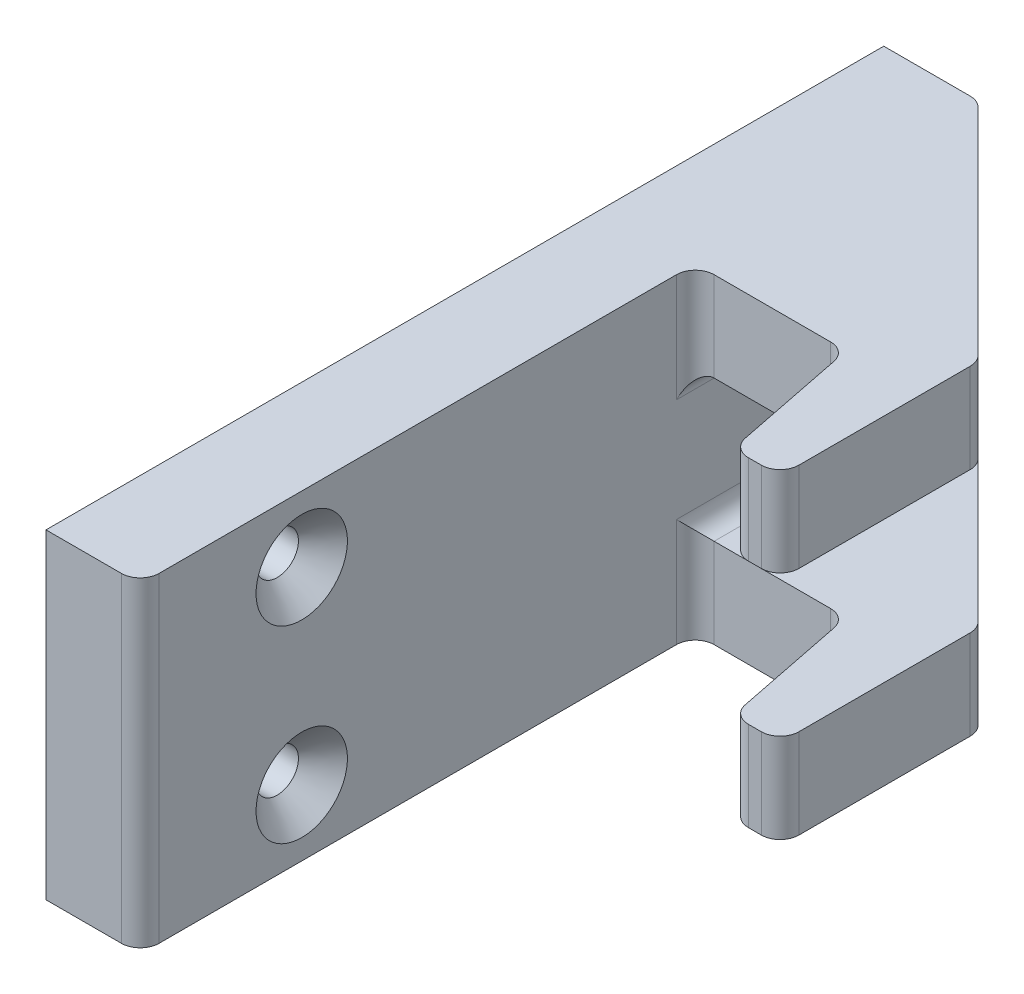
from build123d import *

# Parameters (mm, degrees)
BOSS_EXTRUDE1_DEPTH     = 34
CUT_EXTRUDE1_DEPTH      = 34
CUT_EXTRUDE1_DEPTH_BACK = 34
SKETCH2_W               = 27.245938803
SKETCH2_H               = 15
FILLET1_R               = 2
SKETCH3_R               = 2.25
CUT_EXTRUDE2_DEPTH      = 34
CHAMFER1_SIZE           = 2.6
SKETCH8_W               = 2.320192308
SKETCH8_H               = 0.284935898
CUT_EXTRUDE3_DEPTH      = 1


with BuildPart() as part:
    # Sketch1 → Boss-Extrude1 (new body)
    with BuildSketch(Plane(origin=(0, 0, 0), x_dir=(-1, 0, 0), z_dir=(0, 1, 0))):
        with BuildLine():
            Line((-2, 0), (-14.360392195, 0))
            ThreePointArc((-14.360392195, 0), (-15.628370006, 0.453315717), (-16.321553546, 1.60776773))
            Line((-16.321553546, 1.60776773), (-18.678446454, 13.39223227))
            ThreePointArc((-18.678446454, 13.39223227), (-19.371629994, 14.546684283), (-20.639607805, 15))
            Line((-20.639607805, 15), (-22, 15))
            ThreePointArc((-22, 15), (-23.414213562, 14.414213562), (-24, 13))
            Line((-24, 13), (-24, 0))
            Line((-24, 0), (-24, -5.171572875))
            ThreePointArc((-24, -5.171572875), (-23.847759065, -5.93693974), (-23.414213562, -6.585786438))
            Line((-23.414213562, -6.585786438), (-0.585786438, -29.414213562))
            ThreePointArc((-0.585786438, -29.414213562), (0.06306026, -29.847759065), (0.828427125, -30))
            Line((0.828427125, -30), (10, -30))
            Line((10, -30), (10, 58.9))
            Line((10, 58.9), (2, 58.9))
            ThreePointArc((2, 58.9), (0.585786438, 58.314213562), (0, 56.9))
            Line((0, 56.9), (0, 2))
            ThreePointArc((0, 2), (-0.585786438, 0.585786438), (-2, 0))
        make_face()
    extrude(amount=BOSS_EXTRUDE1_DEPTH)

    # Sketch2 → Cut-Extrude1 (cut, two sides: drawn at the far end of the back side and taken through both)
    with BuildSketch(Plane.XY.offset(-CUT_EXTRUDE1_DEPTH_BACK)):
        with Locations((13.622969402, 17)):
            Rectangle(SKETCH2_W, SKETCH2_H)
    extrude(amount=CUT_EXTRUDE1_DEPTH + CUT_EXTRUDE1_DEPTH_BACK, mode=Mode.SUBTRACT)

    # Fillet1
    fillet1_edges = [part.edges().sort_by_distance(p)[0] for p in [
        (0, 24.5, -13.910179721),
        (0, 9.5, -13.910179721),
    ]]
    fillet(fillet1_edges, radius=FILLET1_R)

    # Sketch3 → Cut-Extrude2 (cut)
    with BuildSketch(Plane.YZ):
        with Locations((17, -13.910179721)):
            Circle(SKETCH3_R)
        with Locations((7, 41.763505667)):
            Circle(SKETCH3_R)
        with Locations((27, 41.763505667)):
            Circle(SKETCH3_R)
    extrude(amount=-CUT_EXTRUDE2_DEPTH, mode=Mode.SUBTRACT)

    # Chamfer1
    chamfer1_edges = [part.edges().sort_by_distance(p)[0] for p in [
        (0, 14.75, -13.910179721),
        (0, 24.75, 41.763505667),
        (0, 4.75, 41.763505667),
    ]]
    chamfer(chamfer1_edges, length=CHAMFER1_SIZE)

    # Sketch8 → Cut-Extrude3 (cut)
    # profile 1 of 35: a face of its own
    with BuildSketch(Plane(origin=(-10, 0, 0), x_dir=(0, -1, 0), z_dir=(-1, 0, 0))):
        with BuildLine():
            Line((-21.392559362, 31.595300944), (-21.392559362, 31.310365047))
            Line((-21.392559362, 31.310365047), (-22.766993457, 31.310365047))
            add(Edge.make_bspline(
                [(-22.766993457, 31.310365047), (-22.728811725, 31.27973273), (-22.654587899, 31.220184678), (-22.556766854, 31.120591046), (-22.473257652, 31.017077582), (-22.405958383, 30.907902945), (-22.35323935, 30.794583689), (-22.315321272, 30.676529747), (-22.292518937, 30.553535745), (-22.28956491, 30.46985706), (-22.288072183, 30.427572579)],
                knots=[0, 0, 0, 0, 1.125719942, 2.188356526, 3.205611246, 4.180516366, 5.132291467, 6.075069812, 7.02729502, 8, 8, 8, 8], degree=3))
            add(Edge.make_bspline(
                [(-22.288072183, 30.427572579), (-22.289657892, 30.384638312), (-22.292761507, 30.300605596), (-22.317233314, 30.178232476), (-22.359291431, 30.063852585), (-22.416265452, 29.957648256), (-22.48760821, 29.862430668), (-22.570424491, 29.77884807), (-22.665666265, 29.71000105), (-22.753924834, 29.663227127), (-22.832423055, 29.632766373), (-22.899767302, 29.613489076), (-22.974807551, 29.597142739), (-23.057507093, 29.582900944), (-23.148262323, 29.573408948), (-23.246663978, 29.565784768), (-23.352706361, 29.560363268), (-23.426112587, 29.56015317), (-23.464068777, 29.560044534)],
                knots=[0, 0, 0, 0, 1.23557613, 2.418320525, 3.575024647, 4.733016537, 5.875704003, 6.989294038, 8.107658508, 9.246262776, 9.854990416, 10.529125826, 11.260725398, 12.065539328, 12.943870397, 13.886749146, 14.907300446, 16, 16, 16, 16], degree=3))
            Line((-23.464068777, 29.560044534), (-24.648969619, 29.560044534))
            Line((-24.648969619, 29.560044534), (-24.648969619, 29.844980432))
            Line((-24.648969619, 29.844980432), (-23.557563369, 29.844980432))
            add(Edge.make_bspline(
                [(-23.557563369, 29.844980432), (-23.525974233, 29.845153064), (-23.465549592, 29.84548328), (-23.379038908, 29.846574885), (-23.300574557, 29.849011666), (-23.230408008, 29.852949415), (-23.168441439, 29.857090801), (-23.11476484, 29.862790668), (-23.069304487, 29.869422094), (-23.041940859, 29.875380917), (-23.029668737, 29.878053348)],
                knots=[0, 0, 0, 0, 1.430932559, 2.737130458, 3.918967929, 4.986496826, 5.920444988, 6.731744033, 7.431208747, 8, 8, 8, 8], degree=3))
            add(Edge.make_bspline(
                [(-23.029668737, 29.878053348), (-22.993660227, 29.88841672), (-22.924434077, 29.908340243), (-22.83039935, 29.954648719), (-22.7502152, 30.012484925), (-22.685002331, 30.083111897), (-22.633633914, 30.165398469), (-22.598610171, 30.259758534), (-22.576282344, 30.365052255), (-22.574132015, 30.43910962), (-22.57300808, 30.477817972)],
                knots=[0, 0, 0, 0, 1.090097712, 2.095706502, 3.037208793, 3.95517211, 4.879102211, 5.845071496, 6.873660557, 8, 8, 8, 8], degree=3))
            add(Edge.make_bspline(
                [(-22.57300808, 30.477817972), (-22.573439723, 30.500739452), (-22.574293932, 30.546100468), (-22.582869969, 30.613363901), (-22.596884163, 30.678613837), (-22.615847566, 30.74247867), (-22.641651731, 30.803604856), (-22.671524117, 30.863774123), (-22.708089463, 30.921281726), (-22.749115695, 30.97714886), (-22.79453612, 31.029144051), (-22.842475858, 31.077519363), (-22.893525289, 31.120643429), (-22.946865395, 31.159712793), (-23.003227807, 31.19343881), (-23.062069011, 31.222878391), (-23.123466385, 31.247857202), (-23.166079477, 31.260269358), (-23.187401109, 31.266479831)],
                knots=[0, 0, 0, 0, 1.024319606, 2.027102035, 3.025350316, 4.005802111, 5.00026367, 5.987881639, 7.005602596, 8.042517216, 9.083927026, 10.089214625, 11.084353441, 12.06828073, 13.041928858, 14.016821737, 15.00770877, 16, 16, 16, 16], degree=3))
            add(Edge.make_bspline(
                [(-23.187401109, 31.266479831), (-23.202841543, 31.270053454), (-23.236488149, 31.277840819), (-23.291982, 31.286290703), (-23.356467495, 31.293854276), (-23.429846825, 31.300248318), (-23.512388881, 31.304169975), (-23.603530394, 31.308395664), (-23.70384227, 31.309968663), (-23.77359748, 31.31022897), (-23.810062367, 31.310365047)],
                knots=[0, 0, 0, 0, 0.607992626, 1.324890765, 2.152360218, 3.099583803, 4.150613268, 5.323148443, 6.60066238, 8, 8, 8, 8], degree=3))
            Line((-23.810062367, 31.310365047), (-24.648969619, 31.310365047))
            Line((-24.648969619, 31.310365047), (-24.648969619, 31.595300944))
            Line((-24.648969619, 31.595300944), (-21.392559362, 31.595300944))
        make_face()
    # profile 2 of 35: a face of its own
    with BuildSketch(Plane(origin=(-10, 0, 0), x_dir=(0, -1, 0), z_dir=(-1, 0, 0))):
        Polygon((-21.392559362, 28.623826585), (-21.392559362, 28.338890688), (-22.328777311, 28.338890688), (-22.328777311, 27.931839406), (-22.613713208, 27.931839406), (-22.613713208, 28.338890688), (-24.648969619, 28.338890688), (-24.648969619, 28.623826585), (-22.613713208, 28.623826585), (-22.613713208, 29.030877868), (-22.328777311, 29.030877868), (-22.328777311, 28.623826585), align=None)
    # profile 3 of 35: a face of its own
    with BuildSketch(Plane(origin=(-10, 0, 0), x_dir=(0, -1, 0), z_dir=(-1, 0, 0))):
        Polygon((-21.392559362, 27.117736842), (-21.392559362, 26.832800944), (-22.328777311, 26.832800944), (-22.328777311, 26.425749662), (-22.613713208, 26.425749662), (-22.613713208, 26.832800944), (-24.648969619, 26.832800944), (-24.648969619, 27.117736842), (-22.613713208, 27.117736842), (-22.613713208, 27.524788124), (-22.328777311, 27.524788124), (-22.328777311, 27.117736842), align=None)
    # profile 4 of 35: a face of its own
    with BuildSketch(Plane(origin=(-10, 0, 0), x_dir=(0, -1, 0), z_dir=(-1, 0, 0))):
        with BuildLine():
            Line((-22.328777311, 25.896582996), (-22.328777311, 25.611647098))
            Line((-22.328777311, 25.611647098), (-22.75808921, 25.611647098))
            add(Edge.make_bspline(
                [(-22.75808921, 25.611647098), (-22.719148262, 25.581379549), (-22.643474323, 25.522560625), (-22.545260232, 25.421192484), (-22.463041264, 25.313689723), (-22.398251539, 25.198429144), (-22.349153492, 25.076799375), (-22.313224345, 24.948923653), (-22.291931304, 24.813734605), (-22.289375577, 24.721298523), (-22.288072183, 24.674157114)],
                knots=[0, 0, 0, 0, 1.082960489, 2.104516986, 3.092433479, 4.050182639, 5.001196938, 5.969027827, 6.964226023, 8, 8, 8, 8], degree=3))
            add(Edge.make_bspline(
                [(-22.288072183, 24.674157114), (-22.289263424, 24.632980446), (-22.291617974, 24.551592597), (-22.307559245, 24.431792382), (-22.334880294, 24.316426141), (-22.374251125, 24.20614655), (-22.422924301, 24.099772198), (-22.484353326, 23.998877864), (-22.555478942, 23.901891996), (-22.637332393, 23.811253739), (-22.725895178, 23.72750507), (-22.821165411, 23.655073177), (-22.920010043, 23.592596521), (-23.023961441, 23.542095609), (-23.132201028, 23.502536608), (-23.245166113, 23.474401865), (-23.362437859, 23.457658145), (-23.442178184, 23.45541165), (-23.482513289, 23.454275303)],
                knots=[0, 0, 0, 0, 1.041296284, 2.058176809, 3.050446431, 4.034000596, 5.01514041, 6.003636468, 7.015969324, 8.052561599, 9.08815499, 10.094063707, 11.074456064, 12.040834395, 13.011057502, 13.983766392, 14.980127149, 16, 16, 16, 16], degree=3))
            add(Edge.make_bspline(
                [(-23.482513289, 23.454275303), (-23.523702025, 23.455380814), (-23.604932157, 23.457561041), (-23.724175908, 23.474654156), (-23.839112023, 23.501519467), (-23.948646678, 23.541788457), (-24.054364658, 23.591091314), (-24.154479316, 23.652779799), (-24.249945072, 23.725160446), (-24.339151547, 23.808009159), (-24.421351118, 23.897853224), (-24.493194216, 23.993917312), (-24.553788005, 24.094768107), (-24.603695792, 24.199923525), (-24.642161431, 24.309750953), (-24.669391958, 24.424191167), (-24.686332799, 24.543268971), (-24.688552222, 24.624279769), (-24.689674747, 24.665252868)],
                knots=[0, 0, 0, 0, 1.038787011, 2.048637893, 3.033314735, 4.011256821, 4.987456671, 5.971770257, 6.972013799, 8.005388554, 9.039095487, 10.040396776, 11.026510796, 12.002710647, 12.972028308, 13.95670515, 14.966556032, 16, 16, 16, 16], degree=3))
            add(Edge.make_bspline(
                [(-24.689674747, 24.665252868), (-24.688535184, 24.711579115), (-24.686294446, 24.802671), (-24.662444042, 24.935967032), (-24.627848158, 25.064097645), (-24.57568911, 25.18570929), (-24.511009394, 25.302272239), (-24.430132954, 25.411937866), (-24.336920549, 25.517153241), (-24.265129476, 25.579758485), (-24.228561967, 25.611647098)],
                knots=[0, 0, 0, 0, 1.019281043, 2.00422519, 2.974076634, 3.936751752, 4.91100001, 5.903882226, 6.932321223, 8, 8, 8, 8], degree=3))
            Line((-24.228561967, 25.611647098), (-25.503777311, 25.611647098))
            Line((-25.503777311, 25.611647098), (-25.503777311, 25.896582996))
            Line((-25.503777311, 25.896582996), (-22.328777311, 25.896582996))
        make_face()
        with BuildLine():
            add(Edge.make_bspline(
                [(-22.57300808, 24.676701185), (-22.573589751, 24.708976501), (-22.574734911, 24.77251828), (-22.588306059, 24.86566279), (-22.60807061, 24.955352566), (-22.637697124, 25.040634277), (-22.674927421, 25.122201874), (-22.719911522, 25.200196881), (-22.774670511, 25.273307643), (-22.836017374, 25.342400362), (-22.903275731, 25.405521808), (-22.975714001, 25.460771751), (-23.052334698, 25.507260796), (-23.132739319, 25.545806461), (-23.217505187, 25.575149058), (-23.306163638, 25.595972456), (-23.398807887, 25.609063044), (-23.461905145, 25.610776553), (-23.493961606, 25.611647098)],
                knots=[0, 0, 0, 0, 1.056783697, 2.080534709, 3.078213817, 4.062450963, 5.032388505, 6.013014931, 7.006476528, 8.020136409, 9.037574406, 10.02408906, 10.99988041, 11.969394914, 12.94050107, 13.932990591, 14.949859205, 16, 16, 16, 16], degree=3))
            add(Edge.make_bspline(
                [(-23.493961606, 25.611647098), (-23.536035829, 25.610185152), (-23.618462796, 25.607321076), (-23.739074261, 25.584590453), (-23.852781144, 25.54616101), (-23.959522575, 25.493344363), (-24.057194966, 25.426120117), (-24.145356914, 25.346012481), (-24.222024433, 25.252110514), (-24.286857959, 25.146870068), (-24.33944937, 25.033988057), (-24.377111853, 24.916257202), (-24.400308696, 24.795275292), (-24.403254135, 24.713479868), (-24.40473885, 24.672249061)],
                knots=[0, 0, 0, 0, 1.037446521, 2.0324456, 3.014856775, 3.990198243, 4.96070402, 5.930645943, 6.919052903, 7.940784962, 8.972706292, 9.9832942, 10.983434506, 12, 12, 12, 12], degree=3))
            add(Edge.make_bspline(
                [(-24.40473885, 24.672249061), (-24.403326982, 24.631848774), (-24.400524678, 24.551661466), (-24.376269493, 24.433589216), (-24.339216568, 24.318845054), (-24.285190023, 24.209820981), (-24.21896832, 24.107487025), (-24.139573224, 24.015017592), (-24.047288352, 23.934379107), (-23.945156301, 23.864814423), (-23.835155843, 23.809258845), (-23.721169525, 23.76854646), (-23.604165755, 23.74427974), (-23.525235834, 23.740902924), (-23.485693377, 23.739211201)],
                knots=[0, 0, 0, 0, 1.000942316, 1.986690553, 2.977613063, 3.984008645, 4.994597959, 5.993715906, 6.995776077, 8.025307715, 9.050480445, 10.043228463, 11.019692995, 12, 12, 12, 12], degree=3))
            add(Edge.make_bspline(
                [(-23.485693377, 23.739211201), (-23.445913195, 23.740535582), (-23.366662758, 23.743174025), (-23.249818243, 23.7689997), (-23.135858931, 23.808158365), (-23.026840234, 23.863848315), (-22.925147606, 23.932163669), (-22.834581171, 24.013391691), (-22.755549631, 24.104735236), (-22.690209277, 24.206941403), (-22.638246409, 24.316656771), (-22.600251099, 24.432148225), (-22.577415142, 24.552838141), (-22.574490023, 24.635050321), (-22.57300808, 24.676701185)],
                knots=[0, 0, 0, 0, 0.983883291, 1.96010114, 2.949781603, 3.961842304, 4.982704228, 5.97556912, 6.965945748, 7.965066277, 8.970293822, 9.964878779, 10.968953791, 12, 12, 12, 12], degree=3))
        make_face(mode=Mode.SUBTRACT)
    # profile 5 of 35: a face of its own
    with BuildSketch(Plane(origin=(-10, 0, 0), x_dir=(0, -1, 0), z_dir=(-1, 0, 0))):
        with BuildLine():
            Line((-22.618165332, 21.785365047), (-22.81723885, 21.978714406))
            add(Edge.make_bspline(
                [(-22.81723885, 21.978714406), (-22.797900601, 21.995394483), (-22.760618735, 22.027551708), (-22.710838738, 22.078598212), (-22.668685594, 22.129430652), (-22.63400077, 22.179780922), (-22.606703494, 22.229742986), (-22.587423715, 22.279743423), (-22.575319939, 22.329645026), (-22.573769445, 22.363017893), (-22.57300808, 22.379405512)],
                knots=[0, 0, 0, 0, 1.265880991, 2.440469525, 3.530740057, 4.536711111, 5.468008477, 6.34654737, 7.188078389, 8, 8, 8, 8], degree=3))
            add(Edge.make_bspline(
                [(-22.57300808, 22.379405512), (-22.573992655, 22.39948349), (-22.575930158, 22.438994111), (-22.594886092, 22.495528029), (-22.624681638, 22.547643253), (-22.666099145, 22.593141781), (-22.714209003, 22.631475853), (-22.767346936, 22.660530927), (-22.825117802, 22.677544993), (-22.865043062, 22.679756311), (-22.885292736, 22.680877868)],
                knots=[0, 0, 0, 0, 1.000196853, 1.968245854, 2.94569445, 3.981000421, 5.021494845, 6.007172807, 6.989258906, 8, 8, 8, 8], degree=3))
            add(Edge.make_bspline(
                [(-22.885292736, 22.680877868), (-22.903627947, 22.679870202), (-22.940246683, 22.677857712), (-22.994265257, 22.66221251), (-23.046931285, 22.637296859), (-23.079191921, 22.614010325), (-23.095814571, 22.602011682)],
                knots=[0, 0, 0, 0, 0.960159726, 1.917612774, 2.927026955, 4, 4, 4, 4], degree=3))
            add(Edge.make_bspline(
                [(-23.095814571, 22.602011682), (-23.104690586, 22.594787655), (-23.123582067, 22.579412225), (-23.149801992, 22.550557358), (-23.178778176, 22.517879802), (-23.20774945, 22.47858243), (-23.238258229, 22.434358283), (-23.269103021, 22.384248361), (-23.302635035, 22.329842917), (-23.323902488, 22.290892646), (-23.334957199, 22.270646497)],
                knots=[0, 0, 0, 0, 0.66740084, 1.420478572, 2.27185888, 3.217733974, 4.268547843, 5.408967954, 6.65319498, 8, 8, 8, 8], degree=3))
            add(Edge.make_bspline(
                [(-23.334957199, 22.270646497), (-23.348786504, 22.245959895), (-23.375500167, 22.198273509), (-23.416965398, 22.130516499), (-23.45817819, 22.069023969), (-23.498697788, 22.013274899), (-23.539657889, 21.964341972), (-23.579488497, 21.920740556), (-23.619393084, 21.883558182), (-23.647272409, 21.862735692), (-23.660598225, 21.852782916)],
                knots=[0, 0, 0, 0, 1.27191281, 2.456916733, 3.569705269, 4.599008579, 5.553216877, 6.436649441, 7.252746552, 8, 8, 8, 8], degree=3))
            add(Edge.make_bspline(
                [(-23.660598225, 21.852782916), (-23.687480318, 21.836180564), (-23.74091492, 21.803179412), (-23.829500334, 21.769875905), (-23.922684093, 21.748589488), (-23.986755737, 21.745983889), (-24.019312167, 21.744659919)],
                knots=[0, 0, 0, 0, 0.995606783, 1.979007074, 2.973082153, 4, 4, 4, 4], degree=3))
            add(Edge.make_bspline(
                [(-24.019312167, 21.744659919), (-24.042235634, 21.745311141), (-24.08740883, 21.746594445), (-24.153923354, 21.755558616), (-24.217584542, 21.77086018), (-24.278764908, 21.792068956), (-24.337345202, 21.819265977), (-24.392884142, 21.853448221), (-24.445853433, 21.893080926), (-24.49595533, 21.937931755), (-24.541411404, 21.987745579), (-24.580957612, 22.041310676), (-24.614356835, 22.097820364), (-24.64177583, 22.157288427), (-24.663618984, 22.219841259), (-24.678731585, 22.285530582), (-24.687779038, 22.354136139), (-24.689034854, 22.400790395), (-24.689674747, 22.424562763)],
                knots=[0, 0, 0, 0, 1.032633728, 2.034917567, 3.017159222, 3.977707287, 4.947659047, 5.920662675, 6.910168127, 7.92466491, 8.94557085, 9.942744688, 10.919024275, 11.897637117, 12.88838639, 13.898512555, 14.929200919, 16, 16, 16, 16], degree=3))
            add(Edge.make_bspline(
                [(-24.689674747, 22.424562763), (-24.688774226, 22.456645844), (-24.686985697, 22.520366213), (-24.670198055, 22.61460903), (-24.644076519, 22.706702861), (-24.608048493, 22.795950787), (-24.562554633, 22.880356905), (-24.508069461, 22.957582815), (-24.446392821, 23.027896784), (-24.399118966, 23.067918361), (-24.375482039, 23.08792915)],
                knots=[0, 0, 0, 0, 1.013940152, 2.01379169, 3.017749504, 4.037548394, 5.051665909, 6.043208538, 7.021604269, 8, 8, 8, 8], degree=3))
            Line((-24.375482039, 23.08792915), (-24.16050808, 22.899031914))
            add(Edge.make_bspline(
                [(-24.16050808, 22.899031914), (-24.179879902, 22.881095511), (-24.217435109, 22.846323081), (-24.267440761, 22.79071412), (-24.309351914, 22.734127092), (-24.344407011, 22.677127055), (-24.371417556, 22.618870255), (-24.390393709, 22.559683162), (-24.402589512, 22.499686163), (-24.404021239, 22.45938894), (-24.40473885, 22.439191169)],
                knots=[0, 0, 0, 0, 1.179806542, 2.287233372, 3.337373186, 4.324005949, 5.273901747, 6.200048787, 7.097828587, 8, 8, 8, 8], degree=3))
            add(Edge.make_bspline(
                [(-24.40473885, 22.439191169), (-24.403495316, 22.411688479), (-24.401065659, 22.357952836), (-24.379006582, 22.280987427), (-24.344417269, 22.209923101), (-24.295354721, 22.148216209), (-24.238245023, 22.095690677), (-24.173915787, 22.057655833), (-24.104254965, 22.033819588), (-24.055965662, 22.031020147), (-24.031396502, 22.029595816)],
                knots=[0, 0, 0, 0, 1.072336372, 2.095165389, 3.102688358, 4.141489647, 5.156069229, 6.117746104, 7.042326257, 8, 8, 8, 8], degree=3))
            add(Edge.make_bspline(
                [(-24.031396502, 22.029595816), (-24.011158491, 22.03058124), (-23.971201246, 22.032526828), (-23.91337058, 22.047806082), (-23.858516304, 22.071947741), (-23.826412838, 22.095719101), (-23.810062367, 22.107825985)],
                knots=[0, 0, 0, 0, 1.013901739, 2.00181326, 2.98231254, 4, 4, 4, 4], degree=3))
            add(Edge.make_bspline(
                [(-23.810062367, 22.107825985), (-23.801866003, 22.115103442), (-23.784011361, 22.130956374), (-23.758225754, 22.160035057), (-23.730432621, 22.194852889), (-23.701103251, 22.235801465), (-23.670624517, 22.282963334), (-23.639156318, 22.336529644), (-23.605204024, 22.395766574), (-23.582689051, 22.437649933), (-23.570919739, 22.459543733)],
                knots=[0, 0, 0, 0, 0.615000592, 1.339693406, 2.178160186, 3.116406724, 4.166410947, 5.330106347, 6.604359322, 8, 8, 8, 8], degree=3))
            add(Edge.make_bspline(
                [(-23.570919739, 22.459543733), (-23.55773067, 22.483171756), (-23.532152855, 22.528994034), (-23.492314696, 22.593897648), (-23.451795097, 22.65245132), (-23.412867021, 22.706063984), (-23.373478022, 22.753381468), (-23.333584373, 22.794217363), (-23.294794957, 22.830179424), (-23.267310981, 22.850088861), (-23.25418296, 22.859598821)],
                knots=[0, 0, 0, 0, 1.262093308, 2.447601706, 3.550203992, 4.582594899, 5.537233252, 6.418365656, 7.244515135, 8, 8, 8, 8], degree=3))
            add(Edge.make_bspline(
                [(-23.25418296, 22.859598821), (-23.227743724, 22.876045865), (-23.174856011, 22.908945701), (-23.086581507, 22.94089091), (-22.993649205, 22.962849236), (-22.92952613, 22.964810833), (-22.896741053, 22.965813765)],
                knots=[0, 0, 0, 0, 0.985009483, 1.970363186, 2.962279964, 4, 4, 4, 4], degree=3))
            add(Edge.make_bspline(
                [(-22.896741053, 22.965813765), (-22.875309491, 22.965329103), (-22.833364887, 22.964380552), (-22.771733984, 22.956812293), (-22.713182097, 22.943027636), (-22.656815065, 22.925755157), (-22.603778582, 22.901683502), (-22.553057624, 22.87309406), (-22.505600448, 22.838593977), (-22.461169914, 22.79981542), (-22.420392742, 22.757658717), (-22.385427528, 22.711487158), (-22.355359357, 22.662953158), (-22.330181972, 22.611773914), (-22.311128115, 22.557510576), (-22.298013914, 22.500528303), (-22.289255071, 22.440946291), (-22.288472157, 22.40021453), (-22.288072183, 22.379405512)],
                knots=[0, 0, 0, 0, 1.087761869, 2.12890409, 3.144425528, 4.138218063, 5.116152125, 6.094559764, 7.089109474, 8.088306095, 9.085414286, 10.060442677, 11.0220762, 11.979848209, 12.949875201, 13.933947973, 14.944496518, 16, 16, 16, 16], degree=3))
            add(Edge.make_bspline(
                [(-22.288072183, 22.379405512), (-22.289071632, 22.354737215), (-22.29108928, 22.30493787), (-22.307187452, 22.230249342), (-22.333403696, 22.155755442), (-22.370461971, 22.08137982), (-22.417072641, 22.006805604), (-22.474444023, 21.932367064), (-22.540956676, 21.856854804), (-22.591854072, 21.809727413), (-22.618165332, 21.785365047)],
                knots=[0, 0, 0, 0, 0.845753203, 1.707371858, 2.609134499, 3.549244224, 4.552329203, 5.621587647, 6.770486714, 8, 8, 8, 8], degree=3))
        make_face()
    # profile 6 of 35: a face of its own
    with BuildSketch(Plane(origin=(-10, 0, 0), x_dir=(0, -1, 0), z_dir=(-1, 0, 0))):
        with BuildLine():
            add(Edge.make_bspline(
                [(-22.288072183, 20.869499662), (-22.289088088, 20.851807018), (-22.291067942, 20.817326574), (-22.305618888, 20.767397848), (-22.330170522, 20.721772005), (-22.363904718, 20.681382108), (-22.404178758, 20.647812928), (-22.449688699, 20.622978793), (-22.499762176, 20.607760873), (-22.534740008, 20.605879805), (-22.552655516, 20.604916329)],
                knots=[0, 0, 0, 0, 1.020591893, 1.988988293, 2.974634352, 3.991697318, 5.008760285, 5.983632262, 6.967224335, 8, 8, 8, 8], degree=3))
            add(Edge.make_bspline(
                [(-22.552655516, 20.604916329), (-22.570571025, 20.605879805), (-22.605548857, 20.607760873), (-22.655622333, 20.622978793), (-22.701132274, 20.647812928), (-22.741406315, 20.681382108), (-22.775140511, 20.721772005), (-22.799692145, 20.767397848), (-22.81424309, 20.817326574), (-22.816222944, 20.851807018), (-22.81723885, 20.869499662)],
                knots=[0, 0, 0, 0, 1.032775665, 2.016367738, 2.991239715, 4.008302682, 5.025365648, 6.011011707, 6.979408107, 8, 8, 8, 8], degree=3))
            add(Edge.make_bspline(
                [(-22.81723885, 20.869499662), (-22.816188227, 20.887180069), (-22.814128604, 20.92184044), (-22.799998336, 20.97195022), (-22.774907979, 21.017302519), (-22.741468173, 21.057699627), (-22.700922822, 21.090997645), (-22.655932247, 21.116982164), (-22.605402946, 21.130989343), (-22.57054174, 21.133033963), (-22.552655516, 21.134082996)],
                knots=[0, 0, 0, 0, 1.020151414, 1.999887582, 2.974338812, 3.990962822, 5.007586832, 5.987933904, 6.967670073, 8, 8, 8, 8], degree=3))
            add(Edge.make_bspline(
                [(-22.552655516, 21.134082996), (-22.53519607, 21.133001756), (-22.500766299, 21.130869566), (-22.450661495, 21.116975844), (-22.405619321, 21.091029188), (-22.365169005, 21.057487768), (-22.330921513, 21.017544106), (-22.306163799, 20.971808331), (-22.29097318, 20.921967155), (-22.28905101, 20.887202759), (-22.288072183, 20.869499662)],
                knots=[0, 0, 0, 0, 1.009624703, 1.990965087, 2.972917375, 3.991206001, 5.017354006, 5.993400798, 6.978178195, 8, 8, 8, 8], degree=3))
        make_face()
    # profile 7 of 35: a face of its own
    with BuildSketch(Plane(origin=(-10, 0, 0), x_dir=(0, -1, 0), z_dir=(-1, 0, 0))):
        with BuildLine():
            add(Edge.make_bspline(
                [(-24.16050808, 20.869499662), (-24.161523985, 20.851807018), (-24.16350384, 20.817326574), (-24.178054785, 20.767397848), (-24.202606419, 20.721772005), (-24.236340615, 20.681382108), (-24.276614656, 20.647812928), (-24.322124597, 20.622978793), (-24.372198073, 20.607760873), (-24.407175905, 20.605879805), (-24.425091414, 20.604916329)],
                knots=[0, 0, 0, 0, 1.020591893, 1.988988293, 2.974634352, 3.991697318, 5.008760285, 5.983632262, 6.967224335, 8, 8, 8, 8], degree=3))
            add(Edge.make_bspline(
                [(-24.425091414, 20.604916329), (-24.442576137, 20.605918294), (-24.477115277, 20.607897564), (-24.526809867, 20.622947199), (-24.572350068, 20.648007368), (-24.613171627, 20.681152981), (-24.646978038, 20.721781834), (-24.671310748, 20.767508155), (-24.686879865, 20.817206879), (-24.688728055, 20.851786877), (-24.689674747, 20.869499662)],
                knots=[0, 0, 0, 0, 1.009852967, 1.994853009, 2.971120474, 3.99910934, 5.017628188, 6.004685157, 6.977947174, 8, 8, 8, 8], degree=3))
            add(Edge.make_bspline(
                [(-24.689674747, 20.869499662), (-24.688692515, 20.887199694), (-24.68676366, 20.921958073), (-24.671621649, 20.971843), (-24.646744758, 21.017292532), (-24.613234111, 21.057929297), (-24.5721386, 21.090799612), (-24.527119908, 21.117014272), (-24.476971724, 21.130859638), (-24.442547863, 21.132998415), (-24.425091414, 21.134082996)],
                knots=[0, 0, 0, 0, 1.021616397, 2.006195831, 2.982046417, 4.000130345, 5.027680246, 6.00943514, 6.990578253, 8, 8, 8, 8], degree=3))
            add(Edge.make_bspline(
                [(-24.425091414, 21.134082996), (-24.407205189, 21.133033963), (-24.372343984, 21.130989343), (-24.321814682, 21.116982164), (-24.276824108, 21.090997645), (-24.236278756, 21.057699627), (-24.20283895, 21.017302519), (-24.177748594, 20.97195022), (-24.163618326, 20.92184044), (-24.161558703, 20.887180069), (-24.16050808, 20.869499662)],
                knots=[0, 0, 0, 0, 1.032329927, 2.012066096, 2.992413168, 4.009037178, 5.025661188, 6.000112418, 6.979848586, 8, 8, 8, 8], degree=3))
        make_face()
    # profile 8 of 35: a face of its own
    with BuildSketch(Plane(origin=(-10, 0, 0), x_dir=(0, -1, 0), z_dir=(-1, 0, 0))):
        Polygon((-21.392559362, 18.488249662), (-25.096726029, 19.81625447), (-25.096726029, 20.116454791), (-21.392559362, 18.788449983), align=None)
    # profile 9 of 35: a face of its own
    with BuildSketch(Plane(origin=(-10, 0, 0), x_dir=(0, -1, 0), z_dir=(-1, 0, 0))):
        Polygon((-21.392559362, 16.575108637), (-25.096726029, 17.903113444), (-25.096726029, 18.203313765), (-21.392559362, 16.875308957), align=None)
    # profile 10 of 35: a face of its own
    with BuildSketch(Plane(origin=(-10, 0, 0), x_dir=(0, -1, 0), z_dir=(-1, 0, 0))):
        with BuildLine():
            Line((-22.328777311, 14.092095816), (-22.328777311, 13.807159919))
            Line((-22.328777311, 13.807159919), (-24.170048345, 13.807159919))
            add(Edge.make_bspline(
                [(-24.170048345, 13.807159919), (-24.20927102, 13.807411236), (-24.284980231, 13.807896339), (-24.39445267, 13.81138972), (-24.495568333, 13.818756334), (-24.588788382, 13.827109924), (-24.673680725, 13.839126588), (-24.750498675, 13.853800864), (-24.819315949, 13.87034323), (-24.861702055, 13.884875856), (-24.881752071, 13.891750263)],
                knots=[0, 0, 0, 0, 1.307562039, 2.523909702, 3.650326591, 4.686913197, 5.643429486, 6.506965704, 7.293745905, 8, 8, 8, 8], degree=3))
            add(Edge.make_bspline(
                [(-24.881752071, 13.891750263), (-24.907815121, 13.901899518), (-24.959161953, 13.921894573), (-25.031932921, 13.95936065), (-25.100512559, 14.001249109), (-25.164117257, 14.049260781), (-25.223747742, 14.102181039), (-25.278362742, 14.160981646), (-25.328809885, 14.22461708), (-25.374091088, 14.293605198), (-25.413769395, 14.36724711), (-25.448889093, 14.444563385), (-25.479220734, 14.52533051), (-25.501987025, 14.610325364), (-25.521700024, 14.69825689), (-25.534532252, 14.790147584), (-25.543265099, 14.885463773), (-25.544072705, 14.950274918), (-25.544482439, 14.983156513)],
                knots=[0, 0, 0, 0, 0.981884813, 1.934411902, 2.870642727, 3.801527012, 4.729816098, 5.667674509, 6.616731011, 7.579249157, 8.562291171, 9.552107921, 10.560574871, 11.588648803, 12.640348669, 13.724070705, 14.845319185, 16, 16, 16, 16], degree=3))
            add(Edge.make_bspline(
                [(-25.544482439, 14.983156513), (-25.543707206, 15.031130999), (-25.542192968, 15.12483806), (-25.524487912, 15.261451655), (-25.499616281, 15.391029246), (-25.461574843, 15.511931032), (-25.415215024, 15.623689785), (-25.362412088, 15.725803986), (-25.301255869, 15.816594143), (-25.231884737, 15.898362973), (-25.149360481, 15.972147574), (-25.05211799, 16.041569918), (-24.938663791, 16.108390561), (-24.855394785, 16.147550735), (-24.811790132, 16.168057355)],
                knots=[0, 0, 0, 0, 1.157931887, 2.261752077, 3.322178827, 4.340878186, 5.316509817, 6.24181319, 7.112369066, 7.954886437, 8.824930176, 9.778504873, 10.836691706, 12, 12, 12, 12], degree=3))
            Line((-24.811790132, 16.168057355), (-24.811790132, 15.883121457))
            add(Edge.make_bspline(
                [(-24.811790132, 15.883121457), (-24.84817189, 15.860205025), (-24.919293749, 15.815406221), (-25.011380683, 15.731632956), (-25.090078378, 15.63982436), (-25.153497437, 15.536882076), (-25.201312748, 15.422377773), (-25.23539891, 15.296242565), (-25.255806238, 15.157450051), (-25.258265769, 15.060822814), (-25.259546542, 15.010505271)],
                knots=[0, 0, 0, 0, 0.997731894, 1.950442991, 2.880492273, 3.800895997, 4.748200782, 5.754801363, 6.83083817, 8, 8, 8, 8], degree=3))
            add(Edge.make_bspline(
                [(-25.259546542, 15.010505271), (-25.25825509, 14.960822584), (-25.255765302, 14.865039336), (-25.235298102, 14.727121323), (-25.201398343, 14.601145534), (-25.153758554, 14.488058184), (-25.094920091, 14.389567633), (-25.02982239, 14.304367516), (-24.95615395, 14.23530882), (-24.888322046, 14.188847817), (-24.827883636, 14.159969755), (-24.775856824, 14.141579829), (-24.717025941, 14.126635619), (-24.651588541, 14.114135328), (-24.579451033, 14.103820288), (-24.500448504, 14.097286244), (-24.414760495, 14.092563829), (-24.355348862, 14.092255428), (-24.324600628, 14.092095816)],
                knots=[0, 0, 0, 0, 1.570672572, 3.028099501, 4.397683431, 5.686589315, 6.895122698, 8.017723291, 9.066023084, 10.075791025, 10.603605416, 11.180458235, 11.81795017, 12.521450677, 13.286658401, 14.121327423, 15.027701111, 16, 16, 16, 16], degree=3))
            Line((-24.324600628, 14.092095816), (-24.204393297, 14.092095816))
            add(Edge.make_bspline(
                [(-24.204393297, 14.092095816), (-24.238811931, 14.121016544), (-24.307043788, 14.178349293), (-24.396453273, 14.277361511), (-24.473457119, 14.385508285), (-24.536611166, 14.502605498), (-24.587122173, 14.625784832), (-24.622449002, 14.753712141), (-24.645272625, 14.885240649), (-24.647728548, 14.974369385), (-24.648969619, 15.019409518)],
                knots=[0, 0, 0, 0, 1.012485704, 2.007162095, 2.997754123, 3.998611389, 4.999708251, 5.992315798, 6.98544096, 8, 8, 8, 8], degree=3))
            add(Edge.make_bspline(
                [(-24.648969619, 15.019409518), (-24.648502416, 15.045930991), (-24.64757354, 15.098660083), (-24.639446649, 15.176996175), (-24.627654933, 15.254176287), (-24.610345342, 15.330020418), (-24.588127847, 15.40463801), (-24.56035409, 15.477905752), (-24.528953237, 15.550416888), (-24.491966463, 15.620853325), (-24.450816434, 15.688513707), (-24.406240205, 15.752887067), (-24.358472476, 15.813638512), (-24.307037081, 15.870181404), (-24.252027331, 15.922472571), (-24.19395978, 15.971100084), (-24.132377644, 16.015624329), (-24.067256954, 16.055468264), (-24.000185428, 16.091869645), (-23.930841795, 16.123035829), (-23.859664752, 16.148907769), (-23.787544119, 16.171708904), (-23.713164749, 16.187854925), (-23.637408191, 16.200201115), (-23.55981227, 16.207128125), (-23.507542509, 16.20821539), (-23.481241253, 16.208762483)],
                knots=[0, 0, 0, 0, 1.028796061, 2.045417375, 3.052978994, 4.056772505, 5.061374657, 6.071351207, 7.095367434, 8.125609542, 9.155490328, 10.16637099, 11.162041966, 12.151987513, 13.129482149, 14.104793677, 15.088808581, 16.075021637, 17.065069715, 18.0481558, 19.021557435, 20.00254184, 20.980451754, 21.971763498, 22.979425854, 24, 24, 24, 24], degree=3))
            add(Edge.make_bspline(
                [(-23.481241253, 16.208762483), (-23.454931176, 16.208291855), (-23.402412924, 16.207352421), (-23.324509923, 16.199227712), (-23.247641241, 16.1876634), (-23.172640893, 16.169264212), (-23.098426141, 16.147432315), (-23.026205245, 16.119117243), (-22.955022432, 16.086494668), (-22.885501929, 16.049208622), (-22.818283332, 16.007470883), (-22.754743349, 15.961528882), (-22.694353459, 15.912343037), (-22.637888222, 15.858923497), (-22.58492441, 15.801586035), (-22.535926784, 15.740163979), (-22.490009701, 15.675340493), (-22.448180931, 15.606893553), (-22.411185393, 15.53588504), (-22.377428308, 15.464117437), (-22.350636627, 15.390640484), (-22.327029963, 15.316823962), (-22.310306606, 15.241367897), (-22.297405001, 15.165197476), (-22.289544861, 15.088051927), (-22.288563709, 15.036387515), (-22.288072183, 15.010505271)],
                knots=[0, 0, 0, 0, 1.008914434, 2.013921196, 3.001938835, 3.98818112, 4.973517748, 5.967241793, 6.960633033, 7.975722852, 8.991170928, 9.993245185, 10.981396684, 11.976616977, 12.972235889, 13.973022409, 14.988340224, 16.01763096, 17.047082309, 18.058647952, 19.057085865, 20.044802253, 21.029198803, 22.0185208, 23.007341325, 24, 24, 24, 24], degree=3))
            add(Edge.make_bspline(
                [(-22.288072183, 15.010505271), (-22.289283703, 14.967819903), (-22.291670128, 14.883739175), (-22.310976404, 14.75975552), (-22.341067361, 14.63998747), (-22.384810239, 14.523821491), (-22.444006441, 14.410548517), (-22.522981303, 14.300850272), (-22.620174865, 14.192848799), (-22.695458444, 14.126535345), (-22.734556558, 14.092095816)],
                knots=[0, 0, 0, 0, 0.967343326, 1.905452219, 2.838102277, 3.762990896, 4.713322225, 5.726933809, 6.819495538, 8, 8, 8, 8], degree=3))
            Line((-22.734556558, 14.092095816), (-22.328777311, 14.092095816))
        make_face()
        with BuildLine():
            add(Edge.make_bspline(
                [(-22.57300808, 14.987608637), (-22.574424177, 15.029274364), (-22.577227749, 15.11176367), (-22.601162635, 15.23267498), (-22.638668585, 15.349404315), (-22.692321993, 15.459714117), (-22.757712139, 15.563057779), (-22.836977408, 15.654697277), (-22.927241797, 15.735000462), (-23.028545644, 15.802088273), (-23.137338064, 15.855994682), (-23.251864487, 15.895186057), (-23.370805304, 15.919674447), (-23.451868367, 15.922435961), (-23.492689571, 15.923826585)],
                knots=[0, 0, 0, 0, 1.026331696, 2.03191913, 3.02692423, 4.041490544, 5.047661868, 6.033509946, 7.018359977, 8.017132933, 9.01989117, 10.003339456, 10.994534818, 12, 12, 12, 12], degree=3))
            add(Edge.make_bspline(
                [(-23.492689571, 15.923826585), (-23.523472082, 15.923168521), (-23.584012279, 15.9218743), (-23.6728533, 15.909420772), (-23.757481495, 15.889315074), (-23.837845395, 15.860740777), (-23.914714955, 15.825567275), (-23.986668899, 15.780262573), (-24.055027441, 15.728121474), (-24.118385714, 15.668312682), (-24.176177504, 15.602509698), (-24.226692511, 15.531182337), (-24.268575763, 15.454721233), (-24.304236983, 15.374348137), (-24.330470978, 15.288361448), (-24.35045305, 15.198050539), (-24.361893831, 15.10280964), (-24.363311118, 15.03788363), (-24.364033721, 15.004781113)],
                knots=[0, 0, 0, 0, 1.039892369, 2.045164194, 3.025377528, 3.974939947, 4.923826224, 5.876304068, 6.842270891, 7.825700405, 8.815919897, 9.798017152, 10.773083594, 11.758208475, 12.764450271, 13.80592145, 14.881349344, 16, 16, 16, 16], degree=3))
            add(Edge.make_bspline(
                [(-24.364033721, 15.004781113), (-24.36333739, 14.971249703), (-24.361975722, 14.905679388), (-24.350270405, 14.809911469), (-24.331381902, 14.719167474), (-24.304564, 14.633530662), (-24.270345036, 14.552677495), (-24.227040913, 14.477516969), (-24.17772532, 14.406434815), (-24.120198896, 14.341710574), (-24.056813137, 14.283154834), (-23.987793023, 14.232230624), (-23.914470562, 14.188494796), (-23.83591093, 14.1536855), (-23.753152239, 14.12497193), (-23.664799014, 14.106869765), (-23.572151656, 14.093886853), (-23.508639052, 14.092701904), (-23.476153112, 14.092095816)],
                knots=[0, 0, 0, 0, 1.121992135, 2.194043731, 3.223932285, 4.220423016, 5.193184374, 6.156086365, 7.118779155, 8.084057622, 9.048292205, 10.002025119, 10.950065319, 11.899697616, 12.87359713, 13.875731462, 14.913461982, 16, 16, 16, 16], degree=3))
            add(Edge.make_bspline(
                [(-23.476153112, 14.092095816), (-23.433864058, 14.093310996), (-23.351246108, 14.095685029), (-23.23086212, 14.118088882), (-23.117679075, 14.154211491), (-23.012055134, 14.204872512), (-22.915108732, 14.26835605), (-22.828638064, 14.344820415), (-22.752521663, 14.432943762), (-22.689138473, 14.532485024), (-22.63773744, 14.639723852), (-22.599683119, 14.751887568), (-22.57762532, 14.868659869), (-22.574558731, 14.947660974), (-22.57300808, 14.987608637)],
                knots=[0, 0, 0, 0, 1.070930318, 2.092221514, 3.091405799, 4.074392322, 5.052047932, 6.019043127, 6.99061078, 7.993717296, 9.000730765, 9.998165278, 10.987753177, 12, 12, 12, 12], degree=3))
        make_face(mode=Mode.SUBTRACT)
    # profile 11 of 35: a face of its own
    with BuildSketch(Plane(origin=(-10, 0, 0), x_dir=(0, -1, 0), z_dir=(-1, 0, 0))):
        with BuildLine():
            add(Edge.make_bspline(
                [(-21.351854234, 13.055387082), (-21.352677987, 13.037708627), (-21.354291054, 13.003090815), (-21.367994145, 12.952980703), (-21.391576025, 12.907397866), (-21.42218588, 12.86636363), (-21.459664595, 12.832348134), (-21.502248699, 12.807957214), (-21.548608126, 12.792386124), (-21.580910387, 12.79049472), (-21.597357039, 12.789531714)],
                knots=[0, 0, 0, 0, 1.054986045, 2.065865298, 3.074122704, 4.105114675, 5.109626121, 6.074217918, 7.019490725, 8, 8, 8, 8], degree=3))
            add(Edge.make_bspline(
                [(-21.597357039, 12.789531714), (-21.613376786, 12.790516263), (-21.645045931, 12.7924626), (-21.690601544, 12.807945703), (-21.732592674, 12.832552624), (-21.769998115, 12.86634099), (-21.800590287, 12.907403846), (-21.824176839, 12.952979121), (-21.837878695, 13.003091231), (-21.839491933, 13.037708767), (-21.840315773, 13.055387082)],
                knots=[0, 0, 0, 0, 0.961106377, 1.899993565, 2.859409042, 3.870007927, 4.90724781, 5.921615355, 6.938620636, 8, 8, 8, 8], degree=3))
            add(Edge.make_bspline(
                [(-21.840315773, 13.055387082), (-21.839518391, 13.072862358), (-21.837966393, 13.106875698), (-21.824012908, 13.156064433), (-21.800641578, 13.200913826), (-21.76957476, 13.241276998), (-21.732841396, 13.275735267), (-21.690569825, 13.300251395), (-21.645054006, 13.315775895), (-21.613379499, 13.317716653), (-21.597357039, 13.31869838)],
                knots=[0, 0, 0, 0, 1.055304112, 2.054011575, 3.063363921, 4.096942562, 5.122536081, 6.088009498, 7.032825006, 8, 8, 8, 8], degree=3))
            add(Edge.make_bspline(
                [(-21.597357039, 13.31869838), (-21.580907572, 13.317738301), (-21.54859978, 13.315852645), (-21.502280961, 13.300239345), (-21.459413752, 13.275942279), (-21.422608928, 13.241254734), (-21.391524847, 13.200919654), (-21.368158031, 13.156062915), (-21.354203366, 13.106876101), (-21.352651531, 13.072862495), (-21.351854234, 13.055387082)],
                knots=[0, 0, 0, 0, 0.986662878, 1.937868148, 2.908513651, 3.927890639, 4.955204348, 5.958438607, 6.951092507, 8, 8, 8, 8], degree=3))
        make_face()
    # profile 12 of 35: a face of its own
    with BuildSketch(Plane(origin=(-10, 0, 0), x_dir=(0, -1, 0), z_dir=(-1, 0, 0))):
        with Locations((-23.488873465, 13.054115047)):
            Rectangle(SKETCH8_W, SKETCH8_H)
    # profile 13 of 35: a face of its own
    with BuildSketch(Plane(origin=(-10, 0, 0), x_dir=(0, -1, 0), z_dir=(-1, 0, 0))):
        Polygon((-21.392559362, 11.97542915), (-21.392559362, 11.690493252), (-22.328777311, 11.690493252), (-22.328777311, 11.28344197), (-22.613713208, 11.28344197), (-22.613713208, 11.690493252), (-24.648969619, 11.690493252), (-24.648969619, 11.97542915), (-22.613713208, 11.97542915), (-22.613713208, 12.382480432), (-22.328777311, 12.382480432), (-22.328777311, 11.97542915), align=None)
    # profile 14 of 35: a face of its own
    with BuildSketch(Plane(origin=(-10, 0, 0), x_dir=(0, -1, 0), z_dir=(-1, 0, 0))):
        with BuildLine():
            Line((-21.392559362, 10.754275303), (-21.392559362, 10.469339406))
            Line((-21.392559362, 10.469339406), (-22.766993457, 10.469339406))
            add(Edge.make_bspline(
                [(-22.766993457, 10.469339406), (-22.728811725, 10.438707089), (-22.654587899, 10.379159037), (-22.556766854, 10.279565405), (-22.473257652, 10.176051941), (-22.405958383, 10.066877304), (-22.35323935, 9.953558048), (-22.315321272, 9.835504106), (-22.292518937, 9.712510104), (-22.28956491, 9.628831419), (-22.288072183, 9.586546938)],
                knots=[0, 0, 0, 0, 1.125719942, 2.188356526, 3.205611246, 4.180516366, 5.132291467, 6.075069812, 7.02729502, 8, 8, 8, 8], degree=3))
            add(Edge.make_bspline(
                [(-22.288072183, 9.586546938), (-22.289657892, 9.543612671), (-22.292761507, 9.459579955), (-22.317233314, 9.337206835), (-22.359291431, 9.222826944), (-22.416265452, 9.116622615), (-22.48760821, 9.021405027), (-22.570424491, 8.937822428), (-22.665666265, 8.868975409), (-22.753924834, 8.822201486), (-22.832423055, 8.791740732), (-22.899767302, 8.772463435), (-22.974807551, 8.756117098), (-23.057507093, 8.741875303), (-23.148262323, 8.732383307), (-23.246663978, 8.724759127), (-23.352706361, 8.719337627), (-23.426112587, 8.719127529), (-23.464068777, 8.719018893)],
                knots=[0, 0, 0, 0, 1.23557613, 2.418320525, 3.575024647, 4.733016537, 5.875704003, 6.989294038, 8.107658508, 9.246262776, 9.854990416, 10.529125826, 11.260725398, 12.065539328, 12.943870397, 13.886749146, 14.907300446, 16, 16, 16, 16], degree=3))
            Line((-23.464068777, 8.719018893), (-24.648969619, 8.719018893))
            Line((-24.648969619, 8.719018893), (-24.648969619, 9.003954791))
            Line((-24.648969619, 9.003954791), (-23.557563369, 9.003954791))
            add(Edge.make_bspline(
                [(-23.557563369, 9.003954791), (-23.525974233, 9.004127423), (-23.465549592, 9.004457639), (-23.379038908, 9.005549244), (-23.300574557, 9.007986025), (-23.230408008, 9.011923774), (-23.168441439, 9.01606516), (-23.11476484, 9.021765027), (-23.069304487, 9.028396453), (-23.041940859, 9.034355276), (-23.029668737, 9.037027707)],
                knots=[0, 0, 0, 0, 1.430932559, 2.737130458, 3.918967929, 4.986496826, 5.920444988, 6.731744033, 7.431208747, 8, 8, 8, 8], degree=3))
            add(Edge.make_bspline(
                [(-23.029668737, 9.037027707), (-22.993660227, 9.047391079), (-22.924434077, 9.067314601), (-22.83039935, 9.113623078), (-22.7502152, 9.171459284), (-22.685002331, 9.242086256), (-22.633633914, 9.324372828), (-22.598610171, 9.418732893), (-22.576282344, 9.524026614), (-22.574132015, 9.598083979), (-22.57300808, 9.636792331)],
                knots=[0, 0, 0, 0, 1.090097712, 2.095706502, 3.037208793, 3.95517211, 4.879102211, 5.845071496, 6.873660557, 8, 8, 8, 8], degree=3))
            add(Edge.make_bspline(
                [(-22.57300808, 9.636792331), (-22.573439723, 9.659713811), (-22.574293932, 9.705074827), (-22.582869969, 9.77233826), (-22.596884163, 9.837588196), (-22.615847566, 9.901453029), (-22.641651731, 9.962579215), (-22.671524117, 10.022748481), (-22.708089463, 10.080256085), (-22.749115695, 10.136123219), (-22.79453612, 10.18811841), (-22.842475858, 10.236493722), (-22.893525289, 10.279617788), (-22.946865395, 10.318687152), (-23.003227807, 10.352413169), (-23.062069011, 10.38185275), (-23.123466385, 10.406831561), (-23.166079477, 10.419243717), (-23.187401109, 10.42545419)],
                knots=[0, 0, 0, 0, 1.024319606, 2.027102035, 3.025350316, 4.005802111, 5.00026367, 5.987881639, 7.005602596, 8.042517216, 9.083927026, 10.089214625, 11.084353441, 12.06828073, 13.041928858, 14.016821737, 15.00770877, 16, 16, 16, 16], degree=3))
            add(Edge.make_bspline(
                [(-23.187401109, 10.42545419), (-23.202841543, 10.429027813), (-23.236488149, 10.436815178), (-23.291982, 10.445265062), (-23.356467495, 10.452828635), (-23.429846825, 10.459222677), (-23.512388881, 10.463144334), (-23.603530394, 10.467370023), (-23.70384227, 10.468943022), (-23.77359748, 10.469203329), (-23.810062367, 10.469339406)],
                knots=[0, 0, 0, 0, 0.607992626, 1.324890765, 2.152360218, 3.099583803, 4.150613268, 5.323148443, 6.60066238, 8, 8, 8, 8], degree=3))
            Line((-23.810062367, 10.469339406), (-24.648969619, 10.469339406))
            Line((-24.648969619, 10.469339406), (-24.648969619, 10.754275303))
            Line((-24.648969619, 10.754275303), (-21.392559362, 10.754275303))
        make_face()
    # profile 15 of 35: a face of its own
    with BuildSketch(Plane(origin=(-10, 0, 0), x_dir=(0, -1, 0), z_dir=(-1, 0, 0))):
        with BuildLine():
            Line((-22.328777311, 8.10844197), (-22.328777311, 7.823506073))
            Line((-22.328777311, 7.823506073), (-23.404919138, 7.823506073))
            add(Edge.make_bspline(
                [(-23.404919138, 7.823506073), (-23.436508346, 7.823377345), (-23.496937022, 7.823131094), (-23.58389137, 7.821461098), (-23.663190816, 7.817533084), (-23.73488117, 7.812621972), (-23.798950304, 7.80630632), (-23.855174435, 7.798792128), (-23.904191159, 7.790393417), (-23.933712632, 7.782172241), (-23.947442175, 7.778348821)],
                knots=[0, 0, 0, 0, 1.388932606, 2.656963016, 3.823490214, 4.879454478, 5.816252168, 6.653371382, 7.373723809, 8, 8, 8, 8], degree=3))
            add(Edge.make_bspline(
                [(-23.947442175, 7.778348821), (-23.964698588, 7.772215175), (-23.998852659, 7.760075401), (-24.048191955, 7.738056468), (-24.093886933, 7.710814301), (-24.137715276, 7.68101382), (-24.178320612, 7.646603115), (-24.21596815, 7.608085331), (-24.25109706, 7.566144151), (-24.293465334, 7.504708627), (-24.338302719, 7.420725504), (-24.377529824, 7.310710251), (-24.400628762, 7.191205503), (-24.403343499, 7.108512533), (-24.40473885, 7.066009077)],
                knots=[0, 0, 0, 0, 0.725930277, 1.436768641, 2.137297926, 2.832005607, 3.535753883, 4.242956221, 4.964984144, 5.701683124, 7.198126434, 8.723945959, 10.316137162, 12, 12, 12, 12], degree=3))
            add(Edge.make_bspline(
                [(-24.40473885, 7.066009077), (-24.40334871, 7.023500236), (-24.400665864, 6.941461898), (-24.377878573, 6.823205799), (-24.340702988, 6.714906442), (-24.288082336, 6.617828318), (-24.223930927, 6.532580845), (-24.148624538, 6.461549343), (-24.064579728, 6.402940874), (-24.001873942, 6.377350961), (-23.970338809, 6.364481634)],
                knots=[0, 0, 0, 0, 1.157091467, 2.233085092, 3.266839029, 4.264239195, 5.228693433, 6.160074799, 7.074690074, 8, 8, 8, 8], degree=3))
            add(Edge.make_bspline(
                [(-23.970338809, 6.364481634), (-23.957669651, 6.360674053), (-23.929661234, 6.352256423), (-23.882139782, 6.343277054), (-23.825523843, 6.334853496), (-23.75921885, 6.329237594), (-23.683809506, 6.322828123), (-23.598905837, 6.320614917), (-23.505008297, 6.317454343), (-23.439268045, 6.317429375), (-23.404919138, 6.317416329)],
                knots=[0, 0, 0, 0, 0.557560243, 1.232629526, 2.036798082, 2.970922211, 4.03790722, 5.227863888, 6.551574656, 8, 8, 8, 8], degree=3))
            Line((-23.404919138, 6.317416329), (-22.328777311, 6.317416329))
            Line((-22.328777311, 6.317416329), (-22.328777311, 6.032480432))
            Line((-22.328777311, 6.032480432), (-23.458344619, 6.032480432))
            add(Edge.make_bspline(
                [(-23.458344619, 6.032480432), (-23.496723268, 6.032881111), (-23.571183097, 6.033658484), (-23.679390817, 6.038654444), (-23.780230887, 6.047226547), (-23.873756494, 6.060237564), (-23.959896878, 6.075536629), (-24.038760295, 6.095274369), (-24.110110899, 6.118834696), (-24.175176743, 6.145437965), (-24.234232836, 6.176779076), (-24.289950783, 6.210360853), (-24.34223783, 6.248049486), (-24.39135098, 6.289511185), (-24.437112092, 6.334559731), (-24.479321671, 6.383496091), (-24.518726699, 6.435338682), (-24.554556185, 6.490991292), (-24.586494666, 6.550510757), (-24.614340879, 6.613597614), (-24.637344802, 6.68071206), (-24.656154712, 6.751102272), (-24.671730117, 6.825357292), (-24.682170452, 6.903156946), (-24.688816343, 6.984693827), (-24.689383807, 7.040130658), (-24.689674747, 7.068553148)],
                knots=[0, 0, 0, 0, 1.492959813, 2.896546261, 4.212934643, 5.4282803, 6.568701279, 7.614836728, 8.587629399, 9.489753423, 10.345563548, 11.185732697, 12.018869657, 12.849922188, 13.68387515, 14.5140269, 15.361852057, 16.215154979, 17.085973896, 17.987004002, 18.894652782, 19.842944701, 20.819888734, 21.843945232, 22.894589698, 24, 24, 24, 24], degree=3))
            add(Edge.make_bspline(
                [(-24.689674747, 7.068553148), (-24.689366584, 7.096762129), (-24.688761015, 7.152195402), (-24.682282375, 7.23354003), (-24.671570678, 7.311507695), (-24.656280588, 7.385821199), (-24.637195146, 7.456555117), (-24.614513367, 7.523995963), (-24.58631893, 7.587354052), (-24.554589289, 7.647390584), (-24.518697932, 7.703635608), (-24.479356924, 7.756348389), (-24.436624996, 7.805458248), (-24.390680607, 7.850976017), (-24.340953815, 7.892262789), (-24.287844628, 7.929833055), (-24.231879276, 7.964265209), (-24.171950551, 7.995428098), (-24.10611737, 8.022199476), (-24.033276432, 8.045835306), (-23.952629149, 8.0651671), (-23.864244471, 8.080899196), (-23.768545398, 8.093555146), (-23.664978335, 8.10234186), (-23.553795557, 8.107254792), (-23.477006014, 8.108037712), (-23.437356037, 8.10844197)],
                knots=[0, 0, 0, 0, 1.083640291, 2.129454052, 3.13281866, 4.105697902, 5.042300162, 5.946461698, 6.836384745, 7.703652036, 8.553297018, 9.397182691, 10.228592656, 11.052265423, 11.879314572, 12.708807002, 13.549817954, 14.402308542, 15.300838682, 16.27712199, 17.341985831, 18.484375296, 19.725102775, 21.0496083, 22.476576903, 24, 24, 24, 24], degree=3))
            Line((-23.437356037, 8.10844197), (-22.328777311, 8.10844197))
        make_face()
    # profile 16 of 35: a face of its own
    with BuildSketch(Plane(origin=(-10, 0, 0), x_dir=(0, -1, 0), z_dir=(-1, 0, 0))):
        with BuildLine():
            Line((-24.648969619, 5.38119838), (-21.392559362, 5.38119838))
            Line((-21.392559362, 5.38119838), (-21.392559362, 5.096262483))
            Line((-21.392559362, 5.096262483), (-22.749820981, 5.096262483))
            add(Edge.make_bspline(
                [(-22.749820981, 5.096262483), (-22.712771924, 5.064438258), (-22.640265318, 5.002156874), (-22.546992042, 4.896522113), (-22.466168438, 4.786869139), (-22.401187248, 4.670497809), (-22.350322638, 4.548428834), (-22.314197886, 4.420792443), (-22.291739786, 4.287193681), (-22.289308914, 4.19617495), (-22.288072183, 4.149868252)],
                knots=[0, 0, 0, 0, 1.073845349, 2.101561798, 3.093746447, 4.06731023, 5.027507813, 5.99794647, 6.981435071, 8, 8, 8, 8], degree=3))
            add(Edge.make_bspline(
                [(-22.288072183, 4.149868252), (-22.289194708, 4.108895154), (-22.291414131, 4.027884355), (-22.308354971, 3.908806551), (-22.3355855, 3.794366339), (-22.374051135, 3.684538903), (-22.423958937, 3.579383516), (-22.484552667, 3.478532604), (-22.556395992, 3.382468965), (-22.638594687, 3.292623165), (-22.727804418, 3.209780898), (-22.823258464, 3.137377071), (-22.923252242, 3.075873499), (-23.028443396, 3.02639734), (-23.137539336, 2.98602674), (-23.252102108, 2.959357018), (-23.371110617, 2.942129174), (-23.452134777, 2.939982174), (-23.493325588, 2.938890688)],
                knots=[0, 0, 0, 0, 1.034424137, 2.045232812, 3.030843571, 4.001080581, 4.978206309, 5.965255608, 6.967506581, 8.002193933, 9.036548792, 10.037741014, 11.022988172, 11.995276286, 12.96911093, 13.954721688, 14.960227752, 16, 16, 16, 16], degree=3))
            add(Edge.make_bspline(
                [(-23.493325588, 2.938890688), (-23.53387489, 2.940012316), (-23.613831727, 2.94222399), (-23.731494103, 2.959116177), (-23.844740637, 2.987007431), (-23.953278699, 3.026886505), (-24.057618192, 3.077019699), (-24.156569702, 3.139713499), (-24.251855058, 3.212113477), (-24.340413638, 3.295871019), (-24.422268223, 3.386506885), (-24.493393543, 3.483493377), (-24.554822645, 3.584387549), (-24.603495801, 3.690761943), (-24.642866637, 3.801041524), (-24.670187685, 3.916407768), (-24.686128956, 4.036207981), (-24.688483506, 4.11759583), (-24.689674747, 4.158772499)],
                knots=[0, 0, 0, 0, 1.024244038, 2.01964794, 2.996620209, 3.965911562, 4.936179293, 5.91563013, 6.920572822, 7.955171681, 8.990768464, 10.002129126, 10.989675881, 11.969873457, 12.952483066, 13.943799762, 14.959703725, 16, 16, 16, 16], degree=3))
            add(Edge.make_bspline(
                [(-24.689674747, 4.158772499), (-24.68836991, 4.205913017), (-24.685811352, 4.298347352), (-24.664538716, 4.433548991), (-24.628535154, 4.561378795), (-24.579670619, 4.683274054), (-24.513840975, 4.79786842), (-24.432639719, 4.90629052), (-24.333628774, 5.006732396), (-24.258298932, 5.065907836), (-24.21965772, 5.096262483)],
                knots=[0, 0, 0, 0, 1.035884751, 2.031189381, 2.999123778, 3.950239786, 4.910390163, 5.895605504, 6.920529319, 8, 8, 8, 8], degree=3))
            Line((-24.21965772, 5.096262483), (-24.648969619, 5.096262483))
            Line((-24.648969619, 5.096262483), (-24.648969619, 5.38119838))
        make_face()
        with BuildLine():
            add(Edge.make_bspline(
                [(-24.40473885, 4.161316569), (-24.403256899, 4.119665718), (-24.400331763, 4.037453561), (-24.377495923, 3.916763474), (-24.339500176, 3.801272662), (-24.28753895, 3.691554878), (-24.22219251, 3.589357672), (-24.143183478, 3.497980983), (-24.052663269, 3.416995166), (-23.951462398, 3.348272867), (-23.842506068, 3.292792888), (-23.728758879, 3.253712996), (-23.612157694, 3.227730355), (-23.533108875, 3.225133512), (-23.493325588, 3.223826585)],
                knots=[0, 0, 0, 0, 1.031861621, 2.036730714, 3.032102247, 4.038124785, 5.038035477, 6.029195352, 7.02284546, 8.040167683, 9.05302878, 10.043491941, 11.015338596, 12, 12, 12, 12], degree=3))
            add(Edge.make_bspline(
                [(-23.493325588, 3.223826585), (-23.453573296, 3.225523321), (-23.374227414, 3.228910019), (-23.256766732, 3.253056903), (-23.142592991, 3.293883962), (-23.032590109, 3.349427149), (-22.930458713, 3.418995184), (-22.83817367, 3.499632794), (-22.75877862, 3.592102459), (-22.692556904, 3.694436352), (-22.638530362, 3.803460443), (-22.601477437, 3.9182046), (-22.577222252, 4.036276851), (-22.574419948, 4.116464159), (-22.57300808, 4.156864446)],
                knots=[0, 0, 0, 0, 0.984698701, 1.96546623, 2.957354799, 3.98164001, 5.010280354, 6.011473015, 7.009725998, 8.019440419, 9.024964737, 10.015029379, 10.999924227, 12, 12, 12, 12], degree=3))
            add(Edge.make_bspline(
                [(-22.57300808, 4.156864446), (-22.574419194, 4.198109909), (-22.577219969, 4.279973784), (-22.601519531, 4.400777297), (-22.638758745, 4.518759764), (-22.692205811, 4.631519716), (-22.757665596, 4.736566661), (-22.834287426, 4.830622937), (-22.922531213, 4.910941175), (-23.020676489, 4.977801271), (-23.127169896, 5.030503484), (-23.240292924, 5.069432962), (-23.360359851, 5.091855532), (-23.442564323, 5.094775625), (-23.484421342, 5.096262483)],
                knots=[0, 0, 0, 0, 1.0169775, 2.018493981, 3.029491472, 4.064042901, 5.08895728, 6.077764832, 7.048099865, 8.023317454, 8.999054219, 9.971953187, 10.967355531, 12, 12, 12, 12], degree=3))
            add(Edge.make_bspline(
                [(-23.484421342, 5.096262483), (-23.516477803, 5.095391939), (-23.579575065, 5.093678432), (-23.672219293, 5.080587829), (-23.760877817, 5.059764485), (-23.845643422, 5.030421694), (-23.926049021, 4.991876748), (-24.002666033, 4.945384993), (-24.075118365, 4.890145394), (-24.142322596, 4.826984131), (-24.203786948, 4.758133187), (-24.257752914, 4.684596319), (-24.302857818, 4.606845452), (-24.340039426, 4.525242023), (-24.369679157, 4.439970039), (-24.389440088, 4.350277598), (-24.403012224, 4.257133816), (-24.404157248, 4.193591937), (-24.40473885, 4.161316569)],
                knots=[0, 0, 0, 0, 1.050410851, 2.067540964, 3.060285716, 4.031641603, 5.001405429, 5.977447716, 6.964216063, 7.981915705, 8.995836261, 9.985438752, 10.966317358, 11.93650433, 12.920994585, 13.918930257, 14.942944538, 16, 16, 16, 16], degree=3))
        make_face(mode=Mode.SUBTRACT)
    # profile 17 of 35: a face of its own
    with BuildSketch(Plane(origin=(-10, 0, 0), x_dir=(0, -1, 0), z_dir=(-1, 0, 0))):
        with BuildLine():
            add(Edge.make_bspline(
                [(-24.16050808, 2.063730432), (-24.161523985, 2.046037788), (-24.16350384, 2.011557344), (-24.178054785, 1.961628618), (-24.202606419, 1.916002774), (-24.236340615, 1.875612877), (-24.276614656, 1.842043698), (-24.322124597, 1.817209563), (-24.372198073, 1.801991642), (-24.407175905, 1.800110574), (-24.425091414, 1.799147098)],
                knots=[0, 0, 0, 0, 1.020591893, 1.988988293, 2.974634352, 3.991697318, 5.008760285, 5.983632262, 6.967224335, 8, 8, 8, 8], degree=3))
            add(Edge.make_bspline(
                [(-24.425091414, 1.799147098), (-24.442576137, 1.800149063), (-24.477115277, 1.802128333), (-24.526809867, 1.817177968), (-24.572350068, 1.842238137), (-24.613171627, 1.87538375), (-24.646978038, 1.916012603), (-24.671310748, 1.961738925), (-24.686879865, 2.011437648), (-24.688728055, 2.046017646), (-24.689674747, 2.063730432)],
                knots=[0, 0, 0, 0, 1.009852967, 1.994853009, 2.971120474, 3.99910934, 5.017628188, 6.004685157, 6.977947174, 8, 8, 8, 8], degree=3))
            add(Edge.make_bspline(
                [(-24.689674747, 2.063730432), (-24.688692515, 2.081430463), (-24.68676366, 2.116188842), (-24.671621649, 2.166073769), (-24.646744758, 2.211523302), (-24.613234111, 2.252160066), (-24.5721386, 2.285030381), (-24.527119908, 2.311245041), (-24.476971724, 2.325090407), (-24.442547863, 2.327229184), (-24.425091414, 2.328313765)],
                knots=[0, 0, 0, 0, 1.021616397, 2.006195831, 2.982046417, 4.000130345, 5.027680246, 6.00943514, 6.990578253, 8, 8, 8, 8], degree=3))
            add(Edge.make_bspline(
                [(-24.425091414, 2.328313765), (-24.407205189, 2.327264733), (-24.372343984, 2.325220113), (-24.321814682, 2.311212933), (-24.276824108, 2.285228414), (-24.236278756, 2.251930396), (-24.20283895, 2.211533288), (-24.177748594, 2.16618099), (-24.163618326, 2.116071209), (-24.161558703, 2.081410838), (-24.16050808, 2.063730432)],
                knots=[0, 0, 0, 0, 1.032329927, 2.012066096, 2.992413168, 4.009037178, 5.025661188, 6.000112418, 6.979848586, 8, 8, 8, 8], degree=3))
        make_face()
    # profile 18 of 35: a face of its own
    with BuildSketch(Plane(origin=(-10, 0, 0), x_dir=(0, -1, 0), z_dir=(-1, 0, 0))):
        with BuildLine():
            Line((-22.831867255, -1.131622132), (-22.980059362, -0.893115522))
            add(Edge.make_bspline(
                [(-22.980059362, -0.893115522), (-22.947555137, -0.866964175), (-22.883576089, -0.815489689), (-22.801056389, -0.726079686), (-22.729892763, -0.630747227), (-22.672674174, -0.527694826), (-22.627505991, -0.417825385), (-22.596114698, -0.300912554), (-22.576383518, -0.176992406), (-22.574151662, -0.092022076), (-22.57300808, -0.048484112)],
                knots=[0, 0, 0, 0, 1.026629843, 2.020746545, 2.988156479, 3.951609825, 4.916760838, 5.907688704, 6.927920211, 8, 8, 8, 8], degree=3))
            add(Edge.make_bspline(
                [(-22.57300808, -0.048484112), (-22.573966845, -0.013687099), (-22.575855107, 0.054844671), (-22.587656655, 0.155452982), (-22.60910633, 0.251283568), (-22.637353882, 0.342949579), (-22.675267057, 0.429753583), (-22.721126189, 0.511938765), (-22.775126681, 0.589780014), (-22.836879507, 0.66204075), (-22.904706436, 0.727895534), (-22.976334568, 0.78613859), (-23.052265409, 0.834750169), (-23.131057828, 0.875271803), (-23.214067323, 0.905759542), (-23.300285449, 0.928179475), (-23.390279543, 0.941845328), (-23.451513324, 0.943501141), (-23.482513289, 0.944339406)],
                knots=[0, 0, 0, 0, 1.11253269, 2.191102883, 3.232049486, 4.248096668, 5.252846381, 6.25411548, 7.252444123, 8.276484619, 9.287796331, 10.271127345, 11.222403915, 12.165070373, 13.097940083, 14.043161362, 15.009338842, 16, 16, 16, 16], degree=3))
            add(Edge.make_bspline(
                [(-23.482513289, 0.944339406), (-23.523127137, 0.942729016), (-23.603807596, 0.939529935), (-23.722869271, 0.914346788), (-23.838200422, 0.873388759), (-23.948259578, 0.81623114), (-24.050304163, 0.745118934), (-24.142572647, 0.662139917), (-24.221223395, 0.565453155), (-24.287047988, 0.457896484), (-24.340177125, 0.341411944), (-24.377667106, 0.21692293), (-24.400422396, 0.085489565), (-24.403281241, -0.004506711), (-24.40473885, -0.050392165)],
                knots=[0, 0, 0, 0, 0.966447457, 1.919872872, 2.884287729, 3.873230387, 4.863319139, 5.838939256, 6.818209587, 7.819967013, 8.834377336, 9.85802846, 10.90789553, 12, 12, 12, 12], degree=3))
            add(Edge.make_bspline(
                [(-24.40473885, -0.050392165), (-24.40356002, -0.092442939), (-24.401243307, -0.175083869), (-24.381713462, -0.295885621), (-24.349742451, -0.410893111), (-24.305158511, -0.520102254), (-24.247529979, -0.62331349), (-24.176447017, -0.719859956), (-24.09395453, -0.811662757), (-24.030166084, -0.865635014), (-23.997687567, -0.893115522)],
                knots=[0, 0, 0, 0, 1.039848629, 2.043578496, 3.018386758, 3.987534228, 4.954977003, 5.934852016, 6.948509513, 8, 8, 8, 8], degree=3))
            Line((-23.997687567, -0.893115522), (-24.154147904, -1.131622132))
            add(Edge.make_bspline(
                [(-24.154147904, -1.131622132), (-24.174912894, -1.117481739), (-24.216373952, -1.089247885), (-24.274836501, -1.0420532), (-24.32954735, -0.991137694), (-24.380490165, -0.936740654), (-24.428558537, -0.879552433), (-24.472390229, -0.818084445), (-24.513094386, -0.753383124), (-24.549981449, -0.685151619), (-24.583065998, -0.614061905), (-24.611697564, -0.540111813), (-24.635905487, -0.4636354), (-24.65549362, -0.384804513), (-24.670990159, -0.303494753), (-24.68129664, -0.21976804), (-24.688983015, -0.133640039), (-24.689442171, -0.075426814), (-24.689674747, -0.045940041)],
                knots=[0, 0, 0, 0, 0.954067324, 1.904967979, 2.850944488, 3.791040077, 4.734579251, 5.686741025, 6.656553487, 7.63677735, 8.631289747, 9.633371755, 10.647134148, 11.676547777, 12.717490898, 13.789379914, 14.88025357, 16, 16, 16, 16], degree=3))
            add(Edge.make_bspline(
                [(-24.689674747, -0.045940041), (-24.688866229, -0.000935883), (-24.687281527, 0.087272595), (-24.669856697, 0.216379444), (-24.643587998, 0.339763261), (-24.60588377, 0.457381948), (-24.557347236, 0.569253614), (-24.498059397, 0.675274694), (-24.42752659, 0.775091329), (-24.34700921, 0.867727044), (-24.259693667, 0.952775734), (-24.165528191, 1.025912014), (-24.067654233, 1.089008201), (-23.96493194, 1.141042719), (-23.856972668, 1.180350105), (-23.744621534, 1.20832507), (-23.627881164, 1.22613585), (-23.54829963, 1.228219135), (-23.507953994, 1.229275303)],
                knots=[0, 0, 0, 0, 1.112900083, 2.181292239, 3.217426397, 4.231060065, 5.231907716, 6.230057215, 7.231385915, 8.250448267, 9.26326716, 10.242335464, 11.195469137, 12.140906363, 13.085222324, 14.031808558, 15.002181388, 16, 16, 16, 16], degree=3))
            add(Edge.make_bspline(
                [(-23.507953994, 1.229275303), (-23.480582222, 1.2288509), (-23.42613525, 1.228006692), (-23.345214532, 1.219234465), (-23.26572704, 1.206095715), (-23.187786852, 1.187442998), (-23.111158203, 1.164036882), (-23.036250332, 1.134619892), (-22.962627387, 1.100193653), (-22.891195875, 1.060141253), (-22.822388357, 1.015960825), (-22.756596592, 0.967951628), (-22.695505606, 0.915288167), (-22.637586459, 0.859084556), (-22.58456839, 0.7984893), (-22.534160829, 0.734631268), (-22.488975345, 0.665934634), (-22.446781205, 0.594150226), (-22.409277578, 0.519185299), (-22.376949025, 0.441567473), (-22.349325294, 0.36174432), (-22.32745476, 0.279593578), (-22.30911475, 0.195659054), (-22.297577825, 0.109279715), (-22.289425997, 0.020785909), (-22.288527206, -0.03913634), (-22.288072183, -0.069472693)],
                knots=[0, 0, 0, 0, 0.991083503, 1.971428668, 2.944771278, 3.907728914, 4.872032831, 5.84458753, 6.820199395, 7.813689706, 8.808455339, 9.780676499, 10.761021664, 11.727616056, 12.70141294, 13.675300653, 14.672050164, 15.67696011, 16.690052069, 17.705469636, 18.720567748, 19.746988726, 20.783187267, 21.830086354, 22.901455311, 24, 24, 24, 24], degree=3))
            add(Edge.make_bspline(
                [(-22.288072183, -0.069472693), (-22.288908247, -0.107464041), (-22.290576198, -0.183256838), (-22.304620848, -0.295687179), (-22.325777896, -0.406469069), (-22.357186473, -0.513623233), (-22.394930247, -0.615798857), (-22.438132863, -0.711257097), (-22.487084686, -0.798501225), (-22.541501914, -0.878341722), (-22.602571849, -0.951095568), (-22.67134933, -1.017542566), (-22.74741829, -1.079077008), (-22.803485283, -1.11396254), (-22.831867255, -1.131622132)],
                knots=[0, 0, 0, 0, 1.095247575, 2.185020588, 3.262981163, 4.344680461, 5.40090428, 6.402280576, 7.363136638, 8.282296962, 9.184898179, 10.097200524, 11.036773704, 12, 12, 12, 12], degree=3))
        make_face()
    # profile 19 of 35: a face of its own
    with BuildSketch(Plane(origin=(-10, 0, 0), x_dir=(0, -1, 0), z_dir=(-1, 0, 0))):
        with BuildLine():
            add(Edge.make_bspline(
                [(-22.288072183, -2.822156988), (-22.288996464, -2.865693009), (-22.290808752, -2.951056507), (-22.310273708, -3.076052643), (-22.339791071, -3.195245524), (-22.381340599, -3.309146452), (-22.435855202, -3.416813237), (-22.50177958, -3.519207165), (-22.579559747, -3.616123086), (-22.639761063, -3.674198698), (-22.670318777, -3.703677421)],
                knots=[0, 0, 0, 0, 1.054042676, 2.066720093, 3.05716247, 4.025731183, 4.997454851, 5.974904663, 6.97207755, 8, 8, 8, 8], degree=3))
            add(Edge.make_bspline(
                [(-22.670318777, -3.703677421), (-22.699541465, -3.729061051), (-22.757421299, -3.779337067), (-22.85127032, -3.843803826), (-22.948461697, -3.899340527), (-23.050286057, -3.943847642), (-23.155854509, -3.978940485), (-23.265529905, -4.003855795), (-23.379070034, -4.018675729), (-23.456180658, -4.020674134), (-23.495233641, -4.021686235)],
                knots=[0, 0, 0, 0, 1.025258237, 2.030674902, 3.01204498, 3.988269485, 4.97094183, 5.956517959, 6.965070386, 8, 8, 8, 8], degree=3))
            add(Edge.make_bspline(
                [(-23.495233641, -4.021686235), (-23.534512979, -4.020796022), (-23.612130783, -4.019036919), (-23.72644835, -4.002396638), (-23.837296514, -3.976514869), (-23.944211174, -3.939474553), (-24.047519213, -3.891978289), (-24.14676913, -3.834020229), (-24.242157808, -3.765194138), (-24.332871158, -3.687175048), (-24.416488789, -3.600953813), (-24.489322849, -3.507396816), (-24.551985119, -3.408274787), (-24.601756384, -3.302234611), (-24.641875491, -3.190785737), (-24.669540197, -3.073219281), (-24.686416418, -2.949640121), (-24.68857336, -2.865249115), (-24.689674747, -2.822156988)],
                knots=[0, 0, 0, 0, 0.998669827, 1.973418153, 2.932281609, 3.89081133, 4.846438734, 5.82045571, 6.809776312, 7.834649874, 8.860672198, 9.859676908, 10.845817165, 11.837296335, 12.833502054, 13.853824644, 14.904110009, 16, 16, 16, 16], degree=3))
            add(Edge.make_bspline(
                [(-24.689674747, -2.822156988), (-24.688564247, -2.778855808), (-24.686389276, -2.69404826), (-24.669665732, -2.570003773), (-24.641579905, -2.451942325), (-24.60225305, -2.339966273), (-24.551576313, -2.233926527), (-24.489566662, -2.134438488), (-24.416451908, -2.040837362), (-24.332881152, -1.954589095), (-24.242155233, -1.876577253), (-24.146769798, -1.807749291), (-24.047519039, -1.749791717), (-23.94421122, -1.702295326), (-23.837296501, -1.665255044), (-23.726448353, -1.639373266), (-23.612130782, -1.622732987), (-23.534512979, -1.620973884), (-23.495233641, -1.620083671)],
                knots=[0, 0, 0, 0, 1.099861214, 2.154133753, 3.1731438, 4.178222029, 5.163564916, 6.153006591, 7.15072618, 8.175428628, 9.198983792, 10.187031731, 11.15979573, 12.114193814, 13.071490482, 14.029120454, 15.002614863, 16, 16, 16, 16], degree=3))
            add(Edge.make_bspline(
                [(-23.495233641, -1.620083671), (-23.456392917, -1.621102674), (-23.37949496, -1.623120125), (-23.266168269, -1.637925158), (-23.156678494, -1.662743277), (-23.051517527, -1.697878187), (-22.950139381, -1.742795538), (-22.852707856, -1.79755185), (-22.759283209, -1.862676209), (-22.701478179, -1.912752265), (-22.67222683, -1.938092485)],
                knots=[0, 0, 0, 0, 1.031353054, 2.041901799, 3.029428768, 4.008703097, 4.981709435, 5.96992636, 6.972712378, 8, 8, 8, 8], degree=3))
            add(Edge.make_bspline(
                [(-22.67222683, -1.938092485), (-22.641409259, -1.967529205), (-22.580801084, -2.025421695), (-22.503174381, -2.122784994), (-22.436361184, -2.224738459), (-22.381874016, -2.333099731), (-22.339866459, -2.447317369), (-22.310135942, -2.567396116), (-22.290894851, -2.692847213), (-22.289022449, -2.778624167), (-22.288072183, -2.822156988)],
                knots=[0, 0, 0, 0, 1.027951202, 2.021646915, 2.998468564, 3.9668038, 4.943370589, 5.93035926, 6.949632805, 8, 8, 8, 8], degree=3))
        make_face()
        with BuildLine():
            add(Edge.make_bspline(
                [(-22.57300808, -2.820884953), (-22.57388315, -2.790098726), (-22.5756107, -2.729321013), (-22.588748988, -2.639858462), (-22.609568177, -2.553736025), (-22.639135406, -2.470779315), (-22.677360255, -2.391309182), (-22.724045226, -2.315238186), (-22.779438967, -2.242770701), (-22.842440475, -2.174463436), (-22.910871162, -2.111038367), (-22.984455056, -2.056234115), (-23.061081179, -2.009546997), (-23.141147277, -1.970694639), (-23.225411614, -1.941747626), (-23.312933968, -1.920727099), (-23.403888852, -1.90760033), (-23.465720657, -1.905889142), (-23.497141694, -1.905019568)],
                knots=[0, 0, 0, 0, 1.021589593, 2.016807015, 2.994807536, 3.958602519, 4.934347097, 5.916793557, 6.916107818, 7.957073844, 8.998039869, 10.008589932, 10.997041759, 11.972786337, 12.956492182, 13.948170289, 14.957322718, 16, 16, 16, 16], degree=3))
            add(Edge.make_bspline(
                [(-23.497141694, -1.905019568), (-23.53773997, -1.906473341), (-23.618319956, -1.909358807), (-23.736957951, -1.932942331), (-23.851067879, -1.972115664), (-23.959275827, -2.026133066), (-24.0595673, -2.092657122), (-24.149749865, -2.170443362), (-24.226345721, -2.260567208), (-24.290764126, -2.35995977), (-24.341493559, -2.467212528), (-24.377873309, -2.580527346), (-24.401203952, -2.698872456), (-24.403550238, -2.779858175), (-24.40473885, -2.820884953)],
                knots=[0, 0, 0, 0, 1.016977094, 2.018509362, 3.018404954, 4.033172147, 5.041280572, 6.028085189, 7.007940189, 7.995502847, 8.989109012, 9.972200833, 10.97273166, 12, 12, 12, 12], degree=3))
            add(Edge.make_bspline(
                [(-24.40473885, -2.820884953), (-24.403557123, -2.86191409), (-24.401224429, -2.942904468), (-24.377755108, -3.06141424), (-24.341651751, -3.175039617), (-24.29070683, -3.282403891), (-24.226589206, -3.381841717), (-24.149313505, -3.471322016), (-24.059804373, -3.549778141), (-23.959408807, -3.616368068), (-23.850899657, -3.6695151), (-23.736978976, -3.708872654), (-23.618314601, -3.732399619), (-23.537738176, -3.735292719), (-23.497141694, -3.736750338)],
                knots=[0, 0, 0, 0, 1.027082318, 2.027431966, 3.015401697, 4.008827937, 4.996211763, 5.971861488, 6.96198607, 7.969911943, 8.982141629, 9.981856156, 10.983207064, 12, 12, 12, 12], degree=3))
            add(Edge.make_bspline(
                [(-23.497141694, -3.736750338), (-23.465718148, -3.735887234), (-23.403881406, -3.734188778), (-23.312962432, -3.720969402), (-23.225238507, -3.700275409), (-23.141486857, -3.670060798), (-23.060690131, -3.632541876), (-22.984685152, -3.584719039), (-22.910824384, -3.530170054), (-22.842481721, -3.466628602), (-22.779208774, -3.398329027), (-22.724247013, -3.325317127), (-22.677333595, -3.249210801), (-22.639130699, -3.169715553), (-22.609681982, -3.086946571), (-22.588658296, -3.001085605), (-22.575658603, -2.912019237), (-22.573897239, -2.851457341), (-22.57300808, -2.820884953)],
                knots=[0, 0, 0, 0, 1.043020522, 2.052505155, 3.044509714, 4.030878336, 5.003918577, 5.996372628, 7.007255355, 8.048564058, 9.08987276, 10.095126797, 11.077896669, 12.053962454, 13.01807471, 13.98956039, 14.985105429, 16, 16, 16, 16], degree=3))
        make_face(mode=Mode.SUBTRACT)
    # profile 20 of 35: a face of its own
    with BuildSketch(Plane(origin=(-10, 0, 0), x_dir=(0, -1, 0), z_dir=(-1, 0, 0))):
        with BuildLine():
            Line((-22.328777311, -4.59155803), (-22.328777311, -4.876493927))
            Line((-22.328777311, -4.876493927), (-22.732012487, -4.876493927))
            add(Edge.make_bspline(
                [(-22.732012487, -4.876493927), (-22.69678807, -4.902207164), (-22.629409066, -4.951392712), (-22.539630608, -5.031273889), (-22.464692481, -5.112448261), (-22.424838649, -5.170495139), (-22.405735444, -5.198318847)],
                knots=[0, 0, 0, 0, 1.134266299, 2.169680534, 3.122669868, 4, 4, 4, 4], degree=3))
            add(Edge.make_bspline(
                [(-22.405735444, -5.198318847), (-22.38758772, -5.236296076), (-22.351609333, -5.311587028), (-22.315111748, -5.43080304), (-22.292682549, -5.552790775), (-22.28961516, -5.635166798), (-22.288072183, -5.676604104)],
                knots=[0, 0, 0, 0, 1.014936303, 2.012140481, 3.000054389, 4, 4, 4, 4], degree=3))
            add(Edge.make_bspline(
                [(-22.288072183, -5.676604104), (-22.289022927, -5.704627444), (-22.290904399, -5.760084128), (-22.30307784, -5.842271738), (-22.324373678, -5.922107613), (-22.353284299, -5.999073889), (-22.389415035, -6.071148446), (-22.430961206, -6.137349787), (-22.477890163, -6.196864982), (-22.532019032, -6.249597623), (-22.594919617, -6.297011964), (-22.668274313, -6.340626693), (-22.753734342, -6.380926601), (-22.815752528, -6.403261661), (-22.848403713, -6.41502057)],
                knots=[0, 0, 0, 0, 1.009798505, 1.998336943, 2.985959917, 3.981996858, 4.955664737, 5.886087062, 6.794002107, 7.679958053, 8.601272429, 9.625787331, 10.750030247, 12, 12, 12, 12], degree=3))
            add(Edge.make_bspline(
                [(-22.848403713, -6.41502057), (-22.825975133, -6.427458634), (-22.781838837, -6.451934997), (-22.719374553, -6.49303368), (-22.660948407, -6.536093758), (-22.606513952, -6.581482172), (-22.556340325, -6.629038832), (-22.510260462, -6.678987131), (-22.468080782, -6.731044269), (-22.418789013, -6.803422648), (-22.366636866, -6.897455476), (-22.32083218, -7.016045485), (-22.293114738, -7.139653782), (-22.289761366, -7.223683928), (-22.288072183, -7.266012156)],
                knots=[0, 0, 0, 0, 0.861170869, 1.694663331, 2.509326413, 3.297991968, 4.073691563, 4.829592376, 5.579160782, 6.321830913, 7.768780219, 9.179854006, 10.579417172, 12, 12, 12, 12], degree=3))
            add(Edge.make_bspline(
                [(-22.288072183, -7.266012156), (-22.289539233, -7.304911769), (-22.292410393, -7.381042088), (-22.314956044, -7.491874322), (-22.353670767, -7.595235817), (-22.406496994, -7.690918593), (-22.472880968, -7.777242138), (-22.551864842, -7.852277647), (-22.642889935, -7.915569334), (-22.728516954, -7.956915671), (-22.804114006, -7.984960232), (-22.868526856, -8.002251495), (-22.939421479, -8.017527504), (-23.016882645, -8.030210491), (-23.101183982, -8.039480177), (-23.192187534, -8.046347898), (-23.289964028, -8.050996165), (-23.35742416, -8.051324616), (-23.392198785, -8.051493927)],
                knots=[0, 0, 0, 0, 1.209669288, 2.367440248, 3.500751976, 4.631527125, 5.755587489, 6.87532382, 8.007944318, 9.190864318, 9.82315674, 10.514484317, 11.263564316, 12.079023757, 12.955305781, 13.901327259, 14.918167583, 16, 16, 16, 16], degree=3))
            Line((-23.392198785, -8.051493927), (-24.648969619, -8.051493927))
            Line((-24.648969619, -8.051493927), (-24.648969619, -7.76655803))
            Line((-24.648969619, -7.76655803), (-23.39092675, -7.76655803))
            add(Edge.make_bspline(
                [(-23.39092675, -7.76655803), (-23.361244515, -7.766487379), (-23.304199774, -7.766351598), (-23.222327907, -7.76390809), (-23.147698755, -7.759304055), (-23.080414073, -7.753920491), (-23.020316966, -7.746442174), (-22.967528102, -7.736784806), (-22.921632371, -7.726554298), (-22.870753986, -7.709558241), (-22.814631066, -7.682390129), (-22.754094299, -7.641013019), (-22.701440413, -7.588862629), (-22.655458573, -7.528581226), (-22.618826632, -7.459780208), (-22.591675981, -7.384270339), (-22.575625814, -7.302306298), (-22.573895345, -7.245519248), (-22.57300808, -7.216402781)],
                knots=[0, 0, 0, 0, 1.253542879, 2.409118771, 3.458568974, 4.411070626, 5.259544058, 6.014735414, 6.677123945, 7.243402448, 8.276608576, 9.299873988, 10.325604302, 11.392892819, 12.490509435, 13.603538441, 14.771260462, 16, 16, 16, 16], degree=3))
            add(Edge.make_bspline(
                [(-22.57300808, -7.216402781), (-22.574320713, -7.180423964), (-22.576922516, -7.109109429), (-22.602499868, -7.00517982), (-22.64201998, -6.905578808), (-22.69844425, -6.812983691), (-22.766335358, -6.72769789), (-22.847017616, -6.654307549), (-22.938305438, -6.593681989), (-23.022802277, -6.552629973), (-23.098702493, -6.526695421), (-23.165012233, -6.509571355), (-23.24037909, -6.496251423), (-23.324296598, -6.483759585), (-23.417342405, -6.475606432), (-23.519086097, -6.468196552), (-23.629833689, -6.464730483), (-23.706602185, -6.464245653), (-23.746460604, -6.463993927)],
                knots=[0, 0, 0, 0, 1.090512009, 2.161531735, 3.230072964, 4.332825141, 5.440581378, 6.529496625, 7.62916386, 8.757669174, 9.370357692, 10.061947597, 10.834545503, 11.692923569, 12.636967211, 13.669242667, 14.789864225, 16, 16, 16, 16], degree=3))
            Line((-23.746460604, -6.463993927), (-24.648969619, -6.463993927))
            Line((-24.648969619, -6.463993927), (-24.648969619, -6.17905803))
            Line((-24.648969619, -6.17905803), (-23.469156918, -6.17905803))
            add(Edge.make_bspline(
                [(-23.469156918, -6.17905803), (-23.43587046, -6.178989203), (-23.371830659, -6.178856788), (-23.280002214, -6.176386474), (-23.196455222, -6.171911838), (-23.121399458, -6.16613248), (-23.05463096, -6.159859903), (-22.996368753, -6.149933378), (-22.946370397, -6.139585964), (-22.891003651, -6.123794865), (-22.830944128, -6.096443429), (-22.766428436, -6.054838959), (-22.709570763, -6.003154607), (-22.661355749, -5.941747811), (-22.62183471, -5.872407297), (-22.592919472, -5.796118613), (-22.576241729, -5.713363716), (-22.574106291, -5.656327324), (-22.57300808, -5.626994729)],
                knots=[0, 0, 0, 0, 1.320226356, 2.539982809, 3.643122147, 4.638255983, 5.52602392, 6.301561104, 6.98107216, 7.550523949, 8.58191082, 9.584830316, 10.584890324, 11.614493144, 12.668965657, 13.738783174, 14.837104585, 16, 16, 16, 16], degree=3))
            add(Edge.make_bspline(
                [(-22.57300808, -5.626994729), (-22.574396426, -5.592508594), (-22.57716335, -5.523778953), (-22.602068298, -5.422812163), (-22.64107914, -5.325307306), (-22.69519911, -5.232819776), (-22.762236163, -5.147844145), (-22.841080274, -5.073450175), (-22.930750905, -5.010912311), (-23.014355868, -4.969417734), (-23.088357625, -4.942678969), (-23.151257716, -4.924830403), (-23.221189121, -4.909862626), (-23.297998829, -4.897175655), (-23.381846258, -4.88762889), (-23.472494441, -4.881917114), (-23.570229676, -4.876896383), (-23.637693906, -4.87663137), (-23.672682559, -4.876493927)],
                knots=[0, 0, 0, 0, 1.098813768, 2.189896819, 3.297771711, 4.440532809, 5.596253211, 6.739894833, 7.8864334, 9.072265856, 9.705655743, 10.395080422, 11.156654178, 11.986235968, 12.878145268, 13.847797945, 14.883813667, 16, 16, 16, 16], degree=3))
            Line((-23.672682559, -4.876493927), (-24.648969619, -4.876493927))
            Line((-24.648969619, -4.876493927), (-24.648969619, -4.59155803))
            Line((-24.648969619, -4.59155803), (-22.328777311, -4.59155803))
        make_face()
    # profile 21 of 35: a face of its own
    with BuildSketch(Plane(origin=(-10, 0, 0), x_dir=(0, -1, 0), z_dir=(-1, 0, 0))):
        with BuildLine():
            Line((-28.742559362, 31.595300944), (-28.742559362, 31.310365047))
            Line((-28.742559362, 31.310365047), (-29.145794539, 31.310365047))
            add(Edge.make_bspline(
                [(-29.145794539, 31.310365047), (-29.110570121, 31.28465181), (-29.043191117, 31.235466262), (-28.953412659, 31.155585085), (-28.878474532, 31.074410713), (-28.8386207, 31.016363835), (-28.819517495, 30.988540127)],
                knots=[0, 0, 0, 0, 1.134266299, 2.169680534, 3.122669868, 4, 4, 4, 4], degree=3))
            add(Edge.make_bspline(
                [(-28.819517495, 30.988540127), (-28.801369771, 30.950562898), (-28.765391385, 30.875271946), (-28.728893799, 30.756055935), (-28.7064646, 30.634068199), (-28.703397211, 30.551692176), (-28.701854234, 30.510254871)],
                knots=[0, 0, 0, 0, 1.014936303, 2.012140481, 3.000054389, 4, 4, 4, 4], degree=3))
            add(Edge.make_bspline(
                [(-28.701854234, 30.510254871), (-28.702804979, 30.48223153), (-28.704686451, 30.426774846), (-28.716859891, 30.344587236), (-28.73815573, 30.264751362), (-28.76706635, 30.187785086), (-28.803197087, 30.115710529), (-28.844743257, 30.049509188), (-28.891672214, 29.989993992), (-28.945801083, 29.937261352), (-29.008701668, 29.88984701), (-29.082056364, 29.846232282), (-29.167516393, 29.805932373), (-29.22953458, 29.783597313), (-29.262185765, 29.771838404)],
                knots=[0, 0, 0, 0, 1.009798505, 1.998336943, 2.985959917, 3.981996858, 4.955664737, 5.886087062, 6.794002107, 7.679958053, 8.601272429, 9.625787331, 10.750030247, 12, 12, 12, 12], degree=3))
            add(Edge.make_bspline(
                [(-29.262185765, 29.771838404), (-29.239757185, 29.759400341), (-29.195620889, 29.734923978), (-29.133156604, 29.693825294), (-29.074730458, 29.650765216), (-29.020296004, 29.605376803), (-28.970122377, 29.557820142), (-28.924042514, 29.507871843), (-28.881862833, 29.455814705), (-28.832571064, 29.383436327), (-28.780418917, 29.289403498), (-28.734614231, 29.17081349), (-28.706896789, 29.047205192), (-28.703543417, 28.963175046), (-28.701854234, 28.920846818)],
                knots=[0, 0, 0, 0, 0.861170869, 1.694663331, 2.509326413, 3.297991968, 4.073691563, 4.829592376, 5.579160782, 6.321830913, 7.768780219, 9.179854006, 10.579417172, 12, 12, 12, 12], degree=3))
            add(Edge.make_bspline(
                [(-28.701854234, 28.920846818), (-28.703321284, 28.881947205), (-28.706192444, 28.805816886), (-28.728738095, 28.694984652), (-28.767452818, 28.591623157), (-28.820279045, 28.495940381), (-28.886663019, 28.409616836), (-28.965646893, 28.334581327), (-29.056671987, 28.27128964), (-29.142299005, 28.229943303), (-29.217896057, 28.201898742), (-29.282308907, 28.184607479), (-29.35320353, 28.16933147), (-29.430664696, 28.156648483), (-29.514966033, 28.147378797), (-29.605969585, 28.140511076), (-29.703746079, 28.13586281), (-29.771206211, 28.135534358), (-29.805980837, 28.135365047)],
                knots=[0, 0, 0, 0, 1.209669288, 2.367440248, 3.500751976, 4.631527125, 5.755587489, 6.87532382, 8.007944318, 9.190864318, 9.82315674, 10.514484317, 11.263564316, 12.079023757, 12.955305781, 13.901327259, 14.918167583, 16, 16, 16, 16], degree=3))
            Line((-29.805980837, 28.135365047), (-31.06275167, 28.135365047))
            Line((-31.06275167, 28.135365047), (-31.06275167, 28.420300944))
            Line((-31.06275167, 28.420300944), (-29.804708801, 28.420300944))
            add(Edge.make_bspline(
                [(-29.804708801, 28.420300944), (-29.775026567, 28.420371595), (-29.717981825, 28.420507376), (-29.636109959, 28.422950884), (-29.561480807, 28.42755492), (-29.494196124, 28.432938484), (-29.434099017, 28.440416801), (-29.381310153, 28.450074168), (-29.335414422, 28.460304676), (-29.284536037, 28.477300734), (-29.228413117, 28.504468846), (-29.16787635, 28.545845956), (-29.115222464, 28.597996345), (-29.069240624, 28.658277748), (-29.032608683, 28.727078767), (-29.005458032, 28.802588636), (-28.989407866, 28.884552677), (-28.987677396, 28.941339726), (-28.986790132, 28.970456193)],
                knots=[0, 0, 0, 0, 1.253542879, 2.409118771, 3.458568974, 4.411070626, 5.259544058, 6.014735414, 6.677123945, 7.243402448, 8.276608576, 9.299873988, 10.325604302, 11.392892819, 12.490509435, 13.603538441, 14.771260462, 16, 16, 16, 16], degree=3))
            add(Edge.make_bspline(
                [(-28.986790132, 28.970456193), (-28.988102764, 29.006435011), (-28.990704567, 29.077749546), (-29.016281919, 29.181679155), (-29.055802032, 29.281280167), (-29.112226301, 29.373875283), (-29.18011741, 29.459161085), (-29.260799667, 29.532551425), (-29.352087489, 29.593176986), (-29.436584329, 29.634229002), (-29.512484544, 29.660163554), (-29.578794285, 29.67728762), (-29.654161141, 29.690607551), (-29.738078649, 29.703099389), (-29.831124456, 29.711252542), (-29.932868148, 29.718662423), (-30.04361574, 29.722128491), (-30.120384236, 29.722613322), (-30.160242656, 29.722865047)],
                knots=[0, 0, 0, 0, 1.090512009, 2.161531735, 3.230072964, 4.332825141, 5.440581378, 6.529496625, 7.62916386, 8.757669174, 9.370357692, 10.061947597, 10.834545503, 11.692923569, 12.636967211, 13.669242667, 14.789864225, 16, 16, 16, 16], degree=3))
            Line((-30.160242656, 29.722865047), (-31.06275167, 29.722865047))
            Line((-31.06275167, 29.722865047), (-31.06275167, 30.007800944))
            Line((-31.06275167, 30.007800944), (-29.88293897, 30.007800944))
            add(Edge.make_bspline(
                [(-29.88293897, 30.007800944), (-29.849652511, 30.007869771), (-29.78561271, 30.008002187), (-29.693784266, 30.010472501), (-29.610237273, 30.014947137), (-29.535181509, 30.020726494), (-29.468413012, 30.026999071), (-29.410150805, 30.036925596), (-29.360152449, 30.04727301), (-29.304785703, 30.063064109), (-29.244726179, 30.090415545), (-29.180210487, 30.132020016), (-29.123352815, 30.183704367), (-29.0751378, 30.245111163), (-29.035616761, 30.314451677), (-29.006701523, 30.390740361), (-28.990023781, 30.473495259), (-28.987888342, 30.53053165), (-28.986790132, 30.559864246)],
                knots=[0, 0, 0, 0, 1.320226356, 2.539982809, 3.643122147, 4.638255983, 5.52602392, 6.301561104, 6.98107216, 7.550523949, 8.58191082, 9.584830316, 10.584890324, 11.614493144, 12.668965657, 13.738783174, 14.837104585, 16, 16, 16, 16], degree=3))
            add(Edge.make_bspline(
                [(-28.986790132, 30.559864246), (-28.988178477, 30.59435038), (-28.990945402, 30.663080021), (-29.015850349, 30.764046812), (-29.054861191, 30.861551668), (-29.108981161, 30.954039199), (-29.176018214, 31.039014829), (-29.254862325, 31.113408799), (-29.344532956, 31.175946664), (-29.42813792, 31.21744124), (-29.502139676, 31.244180006), (-29.565039767, 31.262028571), (-29.634971172, 31.276996348), (-29.71178088, 31.289683319), (-29.795628309, 31.299230085), (-29.886276492, 31.30494186), (-29.984011727, 31.309962592), (-30.051475957, 31.310227605), (-30.086464611, 31.310365047)],
                knots=[0, 0, 0, 0, 1.098813768, 2.189896819, 3.297771711, 4.440532809, 5.596253211, 6.739894833, 7.8864334, 9.072265856, 9.705655743, 10.395080422, 11.156654178, 11.986235968, 12.878145268, 13.847797945, 14.883813667, 16, 16, 16, 16], degree=3))
            Line((-30.086464611, 31.310365047), (-31.06275167, 31.310365047))
            Line((-31.06275167, 31.310365047), (-31.06275167, 31.595300944))
            Line((-31.06275167, 31.595300944), (-28.742559362, 31.595300944))
        make_face()
    # profile 22 of 35: a face of its own
    with BuildSketch(Plane(origin=(-10, 0, 0), x_dir=(0, -1, 0), z_dir=(-1, 0, 0))):
        with BuildLine():
            Line((-30.330059362, 25.579846217), (-30.462987047, 25.326711201))
            add(Edge.make_bspline(
                [(-30.462987047, 25.326711201), (-30.498764856, 25.346885871), (-30.568374305, 25.386137791), (-30.664056374, 25.45358993), (-30.74983681, 25.524384227), (-30.824387685, 25.600962343), (-30.889024131, 25.682381108), (-30.945203255, 25.768760124), (-30.993604128, 25.85981075), (-31.03416542, 25.955853949), (-31.065389593, 26.057719503), (-31.087434219, 26.165690764), (-31.101063248, 26.279964417), (-31.102646231, 26.358292806), (-31.103456798, 26.398400904)],
                knots=[0, 0, 0, 0, 1.120373846, 2.179803828, 3.190307243, 4.151866639, 5.090753574, 6.023181945, 6.960194942, 7.901556876, 8.864247182, 9.862852693, 10.905672442, 12, 12, 12, 12], degree=3))
            add(Edge.make_bspline(
                [(-31.103456798, 26.398400904), (-31.102416146, 26.442979698), (-31.100386136, 26.52994001), (-31.082885116, 26.656522498), (-31.054335186, 26.775702389), (-31.014452173, 26.887473041), (-30.962357335, 26.991560528), (-30.898894282, 27.088172491), (-30.824387871, 27.177814124), (-30.738197128, 27.257671469), (-30.64594688, 27.329531715), (-30.549866577, 27.393055784), (-30.449907356, 27.44579289), (-30.347623772, 27.490142321), (-30.24207452, 27.523744285), (-30.133838083, 27.548340984), (-30.022378137, 27.562249381), (-29.947001126, 27.564406297), (-29.909015692, 27.565493252)],
                knots=[0, 0, 0, 0, 1.145226127, 2.234004399, 3.276654467, 4.290038057, 5.276870678, 6.260645262, 7.254731018, 8.264593254, 9.273837991, 10.257612574, 11.220387342, 12.174754112, 13.118989047, 14.062768009, 15.023752772, 16, 16, 16, 16], degree=3))
            add(Edge.make_bspline(
                [(-29.909015692, 27.565493252), (-29.873369668, 27.56453246), (-29.802723954, 27.562628296), (-29.698161639, 27.550626082), (-29.596535828, 27.52935513), (-29.497762079, 27.500166608), (-29.402005772, 27.462473691), (-29.309208628, 27.416361607), (-29.219469394, 27.361758521), (-29.162860837, 27.319601167), (-29.134346221, 27.298365848)],
                knots=[0, 0, 0, 0, 1.024358464, 2.0301432, 3.019427413, 4.004406732, 4.986367066, 5.972626655, 6.978780325, 8, 8, 8, 8], degree=3))
            add(Edge.make_bspline(
                [(-29.134346221, 27.298365848), (-29.099993746, 27.26960245), (-29.032376996, 27.212986806), (-28.943532943, 27.117232112), (-28.869107518, 27.013545505), (-28.80741533, 26.903226388), (-28.760539951, 26.784992586), (-28.725608073, 26.660433443), (-28.706033734, 26.528130662), (-28.703268913, 26.437683783), (-28.701854234, 26.39140471)],
                knots=[0, 0, 0, 0, 1.030682036, 2.02871468, 2.997146059, 3.962720338, 4.930598197, 5.918074684, 6.934738563, 8, 8, 8, 8], degree=3))
            add(Edge.make_bspline(
                [(-28.701854234, 26.39140471), (-28.70308255, 26.34382724), (-28.705492225, 26.250491088), (-28.727831828, 26.114390521), (-28.763258074, 25.985611871), (-28.813290441, 25.864206671), (-28.87784232, 25.750162612), (-28.957799562, 25.644220981), (-29.050707398, 25.544569966), (-29.122156881, 25.486595755), (-29.158514891, 25.457094815)],
                knots=[0, 0, 0, 0, 1.056321875, 2.072262726, 3.055038591, 4.01806755, 4.982017516, 5.957941055, 6.960871419, 8, 8, 8, 8], degree=3))
            add(Edge.make_bspline(
                [(-29.158514891, 25.457094815), (-29.185913854, 25.437022521), (-29.240529405, 25.39701154), (-29.329584669, 25.346894528), (-29.422757851, 25.303390319), (-29.521555049, 25.268616847), (-29.624805668, 25.240459586), (-29.733247834, 25.220088043), (-29.846849253, 25.208141318), (-29.924252628, 25.205792999), (-29.963713208, 25.204595816)],
                knots=[0, 0, 0, 0, 0.94817472, 1.890038105, 2.849395472, 3.817997239, 4.812318967, 5.836947057, 6.897266129, 8, 8, 8, 8], degree=3))
            Line((-29.963713208, 25.204595816), (-29.963713208, 27.280557355))
            add(Edge.make_bspline(
                [(-29.963713208, 27.280557355), (-29.994283726, 27.279159385), (-30.054399415, 27.276410335), (-30.142374556, 27.263624735), (-30.226138527, 27.243373608), (-30.305334428, 27.215223952), (-30.380222286, 27.179927188), (-30.45131822, 27.138048581), (-30.517542502, 27.087780974), (-30.579753317, 27.031806093), (-30.635133883, 26.969470408), (-30.684740484, 26.903914272), (-30.726087727, 26.834277247), (-30.760154675, 26.761261335), (-30.78637488, 26.68448787), (-30.804431004, 26.604064816), (-30.816493404, 26.520242353), (-30.817836921, 26.463105871), (-30.818520901, 26.434017892)],
                knots=[0, 0, 0, 0, 1.094405546, 2.152104367, 3.174987145, 4.173015398, 5.153654967, 6.133208507, 7.119289451, 8.123438607, 9.122504012, 10.097966803, 11.060604936, 12.014205423, 12.976096155, 13.956823727, 14.959826266, 16, 16, 16, 16], degree=3))
            add(Edge.make_bspline(
                [(-30.818520901, 26.434017892), (-30.817973143, 26.405577198), (-30.816886285, 26.349145405), (-30.806160989, 26.264911272), (-30.78910253, 26.181994671), (-30.765656416, 26.100991147), (-30.736773685, 26.023661926), (-30.702152574, 25.951842326), (-30.664292947, 25.885290396), (-30.620311001, 25.823447962), (-30.567033966, 25.763463149), (-30.499787371, 25.704707638), (-30.421071935, 25.640856138), (-30.361586219, 25.600980121), (-30.330059362, 25.579846217)],
                knots=[0, 0, 0, 0, 0.990963276, 1.966261236, 2.95471375, 3.93937425, 4.902926125, 5.828461241, 6.715766441, 7.568835615, 8.469155523, 9.505141836, 10.677749234, 12, 12, 12, 12], degree=3))
        make_face()
        with BuildLine():
            add(Edge.make_bspline(
                [(-29.678777311, 25.489531714), (-29.640973999, 25.499943009), (-29.568214792, 25.519981401), (-29.467698587, 25.562121595), (-29.377847882, 25.608501127), (-29.300146241, 25.664481757), (-29.231617383, 25.728456718), (-29.171124709, 25.801571034), (-29.11726662, 25.883652612), (-29.071759185, 25.974136087), (-29.033036689, 26.069971683), (-29.007068735, 26.170306389), (-28.989280312, 26.272684764), (-28.987623739, 26.341930835), (-28.986790132, 26.376776305)],
                knots=[0, 0, 0, 0, 1.154756201, 2.222533969, 3.206705588, 4.129403772, 5.035894089, 5.963342549, 6.920206228, 7.923656548, 8.944970878, 9.96070521, 10.973801891, 12, 12, 12, 12], degree=3))
            add(Edge.make_bspline(
                [(-28.986790132, 26.376776305), (-28.987347347, 26.405213937), (-28.988448845, 26.461429156), (-28.998820053, 26.544263644), (-29.016186469, 26.623958003), (-29.039314022, 26.700951038), (-29.071179103, 26.7739026), (-29.107784454, 26.844711141), (-29.152757704, 26.91162761), (-29.18700603, 26.953486111), (-29.20430816, 26.974632876)],
                knots=[0, 0, 0, 0, 1.048700258, 2.073059931, 3.073189922, 4.055269162, 5.032885305, 6.005420607, 6.992345662, 8, 8, 8, 8], degree=3))
            add(Edge.make_bspline(
                [(-29.20430816, 26.974632876), (-29.218000861, 26.989776067), (-29.24571155, 27.020422196), (-29.293453759, 27.061371098), (-29.344935533, 27.100578241), (-29.402126467, 27.136259483), (-29.464375317, 27.168987008), (-29.531157029, 27.19961213), (-29.602978368, 27.227176947), (-29.653027653, 27.242685561), (-29.678777311, 27.250664526)],
                knots=[0, 0, 0, 0, 0.879870761, 1.780643979, 2.707998968, 3.669668524, 4.684282772, 5.740141944, 6.837334558, 8, 8, 8, 8], degree=3))
            Line((-29.678777311, 27.250664526), (-29.678777311, 25.489531714))
        make_face(mode=Mode.SUBTRACT)
    # profile 23 of 35: a face of its own
    with BuildSketch(Plane(origin=(-10, 0, 0), x_dir=(0, -1, 0), z_dir=(-1, 0, 0))):
        with BuildLine():
            Line((-27.806341414, 24.634724021), (-27.806341414, 24.349788124))
            Line((-27.806341414, 24.349788124), (-29.180775508, 24.349788124))
            add(Edge.make_bspline(
                [(-29.180775508, 24.349788124), (-29.142593777, 24.319155807), (-29.068369951, 24.259607755), (-28.970548905, 24.160014123), (-28.887039704, 24.056500659), (-28.819740434, 23.947326022), (-28.767021401, 23.834006766), (-28.729103323, 23.715952824), (-28.706300988, 23.592958821), (-28.703346962, 23.509280137), (-28.701854234, 23.466995656)],
                knots=[0, 0, 0, 0, 1.125719942, 2.188356526, 3.205611246, 4.180516366, 5.132291467, 6.075069812, 7.02729502, 8, 8, 8, 8], degree=3))
            add(Edge.make_bspline(
                [(-28.701854234, 23.466995656), (-28.703439943, 23.424061389), (-28.706543558, 23.340028673), (-28.731015365, 23.217655553), (-28.773073482, 23.103275661), (-28.830047503, 22.997071333), (-28.901390261, 22.901853745), (-28.984206542, 22.818271146), (-29.079448316, 22.749424127), (-29.167706885, 22.702650204), (-29.246205107, 22.67218945), (-29.313549354, 22.652912153), (-29.388589603, 22.636565816), (-29.471289144, 22.622324021), (-29.562044374, 22.612832025), (-29.660446029, 22.605207845), (-29.766488412, 22.599786344), (-29.839894639, 22.599576247), (-29.877850829, 22.599467611)],
                knots=[0, 0, 0, 0, 1.23557613, 2.418320525, 3.575024647, 4.733016537, 5.875704003, 6.989294038, 8.107658508, 9.246262776, 9.854990416, 10.529125826, 11.260725398, 12.065539328, 12.943870397, 13.886749146, 14.907300446, 16, 16, 16, 16], degree=3))
            Line((-29.877850829, 22.599467611), (-31.06275167, 22.599467611))
            Line((-31.06275167, 22.599467611), (-31.06275167, 22.884403509))
            Line((-31.06275167, 22.884403509), (-29.97134542, 22.884403509))
            add(Edge.make_bspline(
                [(-29.97134542, 22.884403509), (-29.939756284, 22.884576141), (-29.879331643, 22.884906357), (-29.792820959, 22.885997962), (-29.714356608, 22.888434743), (-29.644190059, 22.892372492), (-29.582223491, 22.896513878), (-29.528546891, 22.902213745), (-29.483086538, 22.908845171), (-29.455722911, 22.914803994), (-29.443450789, 22.917476425)],
                knots=[0, 0, 0, 0, 1.430932559, 2.737130458, 3.918967929, 4.986496826, 5.920444988, 6.731744033, 7.431208747, 8, 8, 8, 8], degree=3))
            add(Edge.make_bspline(
                [(-29.443450789, 22.917476425), (-29.407442279, 22.927839797), (-29.338216128, 22.947763319), (-29.244181402, 22.994071796), (-29.163997251, 23.051908002), (-29.098784382, 23.122534974), (-29.047415966, 23.204821546), (-29.012392223, 23.299181611), (-28.990064395, 23.404475332), (-28.987914067, 23.478532697), (-28.986790132, 23.517241049)],
                knots=[0, 0, 0, 0, 1.090097712, 2.095706502, 3.037208793, 3.95517211, 4.879102211, 5.845071496, 6.873660557, 8, 8, 8, 8], degree=3))
            add(Edge.make_bspline(
                [(-28.986790132, 23.517241049), (-28.987221774, 23.540162529), (-28.988075983, 23.585523545), (-28.99665202, 23.652786978), (-29.010666215, 23.718036914), (-29.029629617, 23.781901747), (-29.055433783, 23.843027933), (-29.085306169, 23.903197199), (-29.121871514, 23.960704803), (-29.162897746, 24.016571937), (-29.208318171, 24.068567128), (-29.256257909, 24.11694244), (-29.307307341, 24.160066506), (-29.360647446, 24.19913587), (-29.417009859, 24.232861887), (-29.475851062, 24.262301468), (-29.537248437, 24.287280279), (-29.579861528, 24.299692435), (-29.60118316, 24.305902908)],
                knots=[0, 0, 0, 0, 1.024319606, 2.027102035, 3.025350316, 4.005802111, 5.00026367, 5.987881639, 7.005602596, 8.042517216, 9.083927026, 10.089214625, 11.084353441, 12.06828073, 13.041928858, 14.016821737, 15.00770877, 16, 16, 16, 16], degree=3))
            add(Edge.make_bspline(
                [(-29.60118316, 24.305902908), (-29.616623594, 24.309476531), (-29.650270201, 24.317263896), (-29.705764052, 24.32571378), (-29.770249546, 24.333277353), (-29.843628877, 24.339671395), (-29.926170932, 24.343593051), (-30.017312445, 24.347818741), (-30.117624321, 24.34939174), (-30.187379531, 24.349652047), (-30.223844418, 24.349788124)],
                knots=[0, 0, 0, 0, 0.607992626, 1.324890765, 2.152360218, 3.099583803, 4.150613268, 5.323148443, 6.60066238, 8, 8, 8, 8], degree=3))
            Line((-30.223844418, 24.349788124), (-31.06275167, 24.349788124))
            Line((-31.06275167, 24.349788124), (-31.06275167, 24.634724021))
            Line((-31.06275167, 24.634724021), (-27.806341414, 24.634724021))
        make_face()
    # profile 24 of 35: a face of its own
    with BuildSketch(Plane(origin=(-10, 0, 0), x_dir=(0, -1, 0), z_dir=(-1, 0, 0))):
        with BuildLine():
            Line((-28.742559362, 19.587288124), (-31.06275167, 19.587288124))
            Line((-31.06275167, 19.587288124), (-31.06275167, 19.872224021))
            Line((-31.06275167, 19.872224021), (-30.661424547, 19.872224021))
            add(Edge.make_bspline(
                [(-30.661424547, 19.872224021), (-30.697755982, 19.904347206), (-30.768657235, 19.967036004), (-30.861007791, 20.071720277), (-30.937970838, 20.182223991), (-30.999553882, 20.298920818), (-31.04616504, 20.421461606), (-31.078943357, 20.5494969), (-31.100281147, 20.682856058), (-31.102388751, 20.773802405), (-31.103456798, 20.819890287)],
                knots=[0, 0, 0, 0, 1.074295371, 2.096500925, 3.086030275, 4.053105238, 5.014108356, 5.985331429, 6.979048527, 8, 8, 8, 8], degree=3))
            add(Edge.make_bspline(
                [(-31.103456798, 20.819890287), (-31.102344488, 20.860864185), (-31.100150963, 20.941666527), (-31.083128219, 21.060527017), (-31.055805242, 21.174916612), (-31.017759073, 21.284908215), (-30.967552543, 21.389756543), (-30.906795707, 21.490052388), (-30.835152666, 21.586029822), (-30.752930474, 21.675863556), (-30.663719937, 21.758692485), (-30.568291738, 21.831159431), (-30.467956583, 21.892577528), (-30.362742671, 21.943052204), (-30.252726913, 21.982112155), (-30.137984783, 22.009287312), (-30.018707205, 22.026291712), (-29.93748172, 22.028484126), (-29.89629534, 22.029595816)],
                knots=[0, 0, 0, 0, 1.034036272, 2.039165313, 3.024406509, 3.999331371, 4.971254918, 5.953351348, 6.95522652, 7.989525907, 9.023492927, 10.024309745, 11.009187477, 11.988246066, 12.964946762, 13.950187958, 14.960617622, 16, 16, 16, 16], degree=3))
            add(Edge.make_bspline(
                [(-29.89629534, 22.029595816), (-29.855960237, 22.028459469), (-29.776219914, 22.026212972), (-29.658948151, 22.009469264), (-29.545983128, 21.981334477), (-29.437743309, 21.941775638), (-29.333792777, 21.891274122), (-29.234944842, 21.828799773), (-29.13968741, 21.756358939), (-29.051075217, 21.672644779), (-28.969520105, 21.582004754), (-28.897702956, 21.485490336), (-28.837101896, 21.384304962), (-28.787839125, 21.278245741), (-28.748691929, 21.168063666), (-28.721402563, 21.052921744), (-28.705360785, 20.933343593), (-28.703034315, 20.852163785), (-28.701854234, 20.810986041)],
                knots=[0, 0, 0, 0, 1.02050356, 2.017480486, 2.990790918, 3.96161403, 4.928589988, 5.909588639, 6.91611943, 7.952353252, 8.989586576, 9.99823133, 10.991940466, 11.968822692, 12.952985106, 13.945868367, 14.958059758, 16, 16, 16, 16], degree=3))
            add(Edge.make_bspline(
                [(-28.701854234, 20.810986041), (-28.70315213, 20.763631468), (-28.705697242, 20.670771386), (-28.727102927, 20.534770364), (-28.762821766, 20.405994034), (-28.811912508, 20.283700111), (-28.876663605, 20.168363002), (-28.959081712, 20.061402202), (-29.057283988, 19.960664415), (-29.132932868, 19.902277331), (-29.171871261, 19.872224021)],
                knots=[0, 0, 0, 0, 1.03879612, 2.037030165, 3.012306674, 3.966139504, 4.922386257, 5.905048148, 6.921675258, 8, 8, 8, 8], degree=3))
            Line((-29.171871261, 19.872224021), (-28.742559362, 19.872224021))
            Line((-28.742559362, 19.872224021), (-28.742559362, 19.587288124))
        make_face()
        with BuildLine():
            add(Edge.make_bspline(
                [(-28.986790132, 20.807169935), (-28.988272058, 20.848820824), (-28.991197146, 20.931033053), (-29.014033333, 21.051722607), (-29.052027777, 21.167215423), (-29.103993905, 21.276925666), (-29.169322169, 21.379150836), (-29.248398423, 21.4704241), (-29.338708013, 21.551837448), (-29.441010216, 21.619148599), (-29.549432429, 21.675898596), (-29.663630808, 21.714815005), (-29.780437155, 21.740711246), (-29.859692688, 21.743340267), (-29.899475428, 21.744659919)],
                knots=[0, 0, 0, 0, 1.031093775, 2.03521511, 3.029845951, 4.035119871, 5.034286494, 6.024708811, 7.017619509, 8.03559408, 9.050082311, 10.039808432, 11.016071318, 12, 12, 12, 12], degree=3))
            add(Edge.make_bspline(
                [(-29.899475428, 21.744659919), (-29.939012588, 21.742952599), (-30.017931936, 21.739544653), (-30.135085331, 21.715497611), (-30.248823977, 21.67383224), (-30.358748075, 21.618377567), (-30.461260267, 21.549556574), (-30.553335851, 21.468818905), (-30.632729233, 21.37638174), (-30.699181519, 21.273934835), (-30.75267245, 21.164682926), (-30.790391225, 21.049737365), (-30.814208601, 20.931117783), (-30.817078632, 20.850318055), (-30.818520901, 20.809714005)],
                knots=[0, 0, 0, 0, 0.979154363, 1.954470772, 2.947816011, 3.971783346, 4.997163654, 5.998045606, 6.995988793, 8.00538986, 9.015323546, 10.000094788, 10.994993517, 12, 12, 12, 12], degree=3))
            add(Edge.make_bspline(
                [(-30.818520901, 20.809714005), (-30.817037628, 20.768482636), (-30.814095048, 20.686686096), (-30.790876952, 20.565712481), (-30.753354919, 20.44813322), (-30.70064501, 20.335697342), (-30.635618809, 20.231032604), (-30.559156733, 20.137213978), (-30.470976919, 20.057103465), (-30.373287311, 19.989945635), (-30.266693557, 19.936894315), (-30.152720313, 19.899476533), (-30.032263243, 19.876495025), (-29.949824097, 19.873667374), (-29.907743657, 19.872224021)],
                knots=[0, 0, 0, 0, 1.017484689, 2.018529338, 3.030031036, 4.058138743, 5.076350332, 6.065651025, 7.036469986, 8.00785331, 8.984076697, 9.96571663, 10.961615403, 12, 12, 12, 12], degree=3))
            add(Edge.make_bspline(
                [(-29.907743657, 19.872224021), (-29.875687209, 19.873094581), (-29.812589975, 19.874808117), (-29.71994555, 19.887898508), (-29.631287745, 19.908722625), (-29.546519522, 19.938062603), (-29.466123658, 19.976618007), (-29.38946996, 20.023070348), (-29.317272447, 20.078372433), (-29.249622552, 20.140841278), (-29.188227718, 20.209990084), (-29.134114827, 20.283520877), (-29.088320431, 20.361248655), (-29.051672936, 20.443118857), (-29.021817141, 20.528500913), (-29.002097905, 20.618213194), (-28.988514394, 20.711351564), (-28.987370937, 20.774894189), (-28.986790132, 20.807169935)],
                knots=[0, 0, 0, 0, 1.050062701, 2.066855696, 3.059271411, 4.030305351, 4.999747758, 5.975466543, 6.961907836, 7.974539719, 8.98812422, 9.98710676, 10.961662635, 11.93785114, 12.922015094, 13.919620009, 14.94329489, 16, 16, 16, 16], degree=3))
        make_face(mode=Mode.SUBTRACT)
    # profile 25 of 35: a face of its own
    with BuildSketch(Plane(origin=(-10, 0, 0), x_dir=(0, -1, 0), z_dir=(-1, 0, 0))):
        with BuildLine():
            Line((-28.742559362, 18.936006073), (-28.742559362, 18.651070175))
            Line((-28.742559362, 18.651070175), (-29.145794539, 18.651070175))
            add(Edge.make_bspline(
                [(-29.145794539, 18.651070175), (-29.110570121, 18.625356938), (-29.043191117, 18.57617139), (-28.953412659, 18.496290213), (-28.878474532, 18.415115841), (-28.8386207, 18.357068964), (-28.819517495, 18.329245255)],
                knots=[0, 0, 0, 0, 1.134266299, 2.169680534, 3.122669868, 4, 4, 4, 4], degree=3))
            add(Edge.make_bspline(
                [(-28.819517495, 18.329245255), (-28.801369771, 18.291268026), (-28.765391385, 18.215977074), (-28.728893799, 18.096761063), (-28.7064646, 17.974773327), (-28.703397211, 17.892397304), (-28.701854234, 17.850959999)],
                knots=[0, 0, 0, 0, 1.014936303, 2.012140481, 3.000054389, 4, 4, 4, 4], degree=3))
            add(Edge.make_bspline(
                [(-28.701854234, 17.850959999), (-28.702804979, 17.822936658), (-28.704686451, 17.767479974), (-28.716859891, 17.685292364), (-28.73815573, 17.60545649), (-28.76706635, 17.528490214), (-28.803197087, 17.456415657), (-28.844743257, 17.390214316), (-28.891672214, 17.330699121), (-28.945801083, 17.27796648), (-29.008701668, 17.230552138), (-29.082056364, 17.18693741), (-29.167516393, 17.146637501), (-29.22953458, 17.124302441), (-29.262185765, 17.112543533)],
                knots=[0, 0, 0, 0, 1.009798505, 1.998336943, 2.985959917, 3.981996858, 4.955664737, 5.886087062, 6.794002107, 7.679958053, 8.601272429, 9.625787331, 10.750030247, 12, 12, 12, 12], degree=3))
            add(Edge.make_bspline(
                [(-29.262185765, 17.112543533), (-29.239757185, 17.100105469), (-29.195620889, 17.075629106), (-29.133156604, 17.034530422), (-29.074730458, 16.991470344), (-29.020296004, 16.946081931), (-28.970122377, 16.89852527), (-28.924042514, 16.848576971), (-28.881862833, 16.796519834), (-28.832571064, 16.724141455), (-28.780418917, 16.630108626), (-28.734614231, 16.511518618), (-28.706896789, 16.387910321), (-28.703543417, 16.303880174), (-28.701854234, 16.261551946)],
                knots=[0, 0, 0, 0, 0.861170869, 1.694663331, 2.509326413, 3.297991968, 4.073691563, 4.829592376, 5.579160782, 6.321830913, 7.768780219, 9.179854006, 10.579417172, 12, 12, 12, 12], degree=3))
            add(Edge.make_bspline(
                [(-28.701854234, 16.261551946), (-28.703321284, 16.222652333), (-28.706192444, 16.146522014), (-28.728738095, 16.035689781), (-28.767452818, 15.932328286), (-28.820279045, 15.836645509), (-28.886663019, 15.750321964), (-28.965646893, 15.675286455), (-29.056671987, 15.611994769), (-29.142299005, 15.570648431), (-29.217896057, 15.54260387), (-29.282308907, 15.525312608), (-29.35320353, 15.510036598), (-29.430664696, 15.497353612), (-29.514966033, 15.488083925), (-29.605969585, 15.481216205), (-29.703746079, 15.476567938), (-29.771206211, 15.476239487), (-29.805980837, 15.476070175)],
                knots=[0, 0, 0, 0, 1.209669288, 2.367440248, 3.500751976, 4.631527125, 5.755587489, 6.87532382, 8.007944318, 9.190864318, 9.82315674, 10.514484317, 11.263564316, 12.079023757, 12.955305781, 13.901327259, 14.918167583, 16, 16, 16, 16], degree=3))
            Line((-29.805980837, 15.476070175), (-31.06275167, 15.476070175))
            Line((-31.06275167, 15.476070175), (-31.06275167, 15.761006073))
            Line((-31.06275167, 15.761006073), (-29.804708801, 15.761006073))
            add(Edge.make_bspline(
                [(-29.804708801, 15.761006073), (-29.775026567, 15.761076724), (-29.717981825, 15.761212504), (-29.636109959, 15.763656013), (-29.561480807, 15.768260048), (-29.494196124, 15.773643612), (-29.434099017, 15.781121929), (-29.381310153, 15.790779296), (-29.335414422, 15.801009804), (-29.284536037, 15.818005862), (-29.228413117, 15.845173974), (-29.16787635, 15.886551084), (-29.115222464, 15.938701473), (-29.069240624, 15.998982876), (-29.032608683, 16.067783895), (-29.005458032, 16.143293764), (-28.989407866, 16.225257805), (-28.987677396, 16.282044854), (-28.986790132, 16.311161321)],
                knots=[0, 0, 0, 0, 1.253542879, 2.409118771, 3.458568974, 4.411070626, 5.259544058, 6.014735414, 6.677123945, 7.243402448, 8.276608576, 9.299873988, 10.325604302, 11.392892819, 12.490509435, 13.603538441, 14.771260462, 16, 16, 16, 16], degree=3))
            add(Edge.make_bspline(
                [(-28.986790132, 16.311161321), (-28.988102764, 16.347140139), (-28.990704567, 16.418454674), (-29.016281919, 16.522384283), (-29.055802032, 16.621985295), (-29.112226301, 16.714580411), (-29.18011741, 16.799866213), (-29.260799667, 16.873256553), (-29.352087489, 16.933882114), (-29.436584329, 16.97493413), (-29.512484544, 17.000868682), (-29.578794285, 17.017992748), (-29.654161141, 17.031312679), (-29.738078649, 17.043804517), (-29.831124456, 17.05195767), (-29.932868148, 17.059367551), (-30.04361574, 17.062833619), (-30.120384236, 17.06331845), (-30.160242656, 17.063570175)],
                knots=[0, 0, 0, 0, 1.090512009, 2.161531735, 3.230072964, 4.332825141, 5.440581378, 6.529496625, 7.62916386, 8.757669174, 9.370357692, 10.061947597, 10.834545503, 11.692923569, 12.636967211, 13.669242667, 14.789864225, 16, 16, 16, 16], degree=3))
            Line((-30.160242656, 17.063570175), (-31.06275167, 17.063570175))
            Line((-31.06275167, 17.063570175), (-31.06275167, 17.348506073))
            Line((-31.06275167, 17.348506073), (-29.88293897, 17.348506073))
            add(Edge.make_bspline(
                [(-29.88293897, 17.348506073), (-29.849652511, 17.348574899), (-29.78561271, 17.348707315), (-29.693784266, 17.351177629), (-29.610237273, 17.355652265), (-29.535181509, 17.361431622), (-29.468413012, 17.3677042), (-29.410150805, 17.377630724), (-29.360152449, 17.387978139), (-29.304785703, 17.403769237), (-29.244726179, 17.431120673), (-29.180210487, 17.472725144), (-29.123352815, 17.524409495), (-29.0751378, 17.585816291), (-29.035616761, 17.655156805), (-29.006701523, 17.731445489), (-28.990023781, 17.814200387), (-28.987888342, 17.871236779), (-28.986790132, 17.900569374)],
                knots=[0, 0, 0, 0, 1.320226356, 2.539982809, 3.643122147, 4.638255983, 5.52602392, 6.301561104, 6.98107216, 7.550523949, 8.58191082, 9.584830316, 10.584890324, 11.614493144, 12.668965657, 13.738783174, 14.837104585, 16, 16, 16, 16], degree=3))
            add(Edge.make_bspline(
                [(-28.986790132, 17.900569374), (-28.988178477, 17.935055508), (-28.990945402, 18.00378515), (-29.015850349, 18.10475194), (-29.054861191, 18.202256796), (-29.108981161, 18.294744327), (-29.176018214, 18.379719957), (-29.254862325, 18.454113928), (-29.344532956, 18.516651792), (-29.42813792, 18.558146368), (-29.502139676, 18.584885134), (-29.565039767, 18.6027337), (-29.634971172, 18.617701476), (-29.71178088, 18.630388448), (-29.795628309, 18.639935213), (-29.886276492, 18.645646988), (-29.984011727, 18.65066772), (-30.051475957, 18.650932733), (-30.086464611, 18.651070175)],
                knots=[0, 0, 0, 0, 1.098813768, 2.189896819, 3.297771711, 4.440532809, 5.596253211, 6.739894833, 7.8864334, 9.072265856, 9.705655743, 10.395080422, 11.156654178, 11.986235968, 12.878145268, 13.847797945, 14.883813667, 16, 16, 16, 16], degree=3))
            Line((-30.086464611, 18.651070175), (-31.06275167, 18.651070175))
            Line((-31.06275167, 18.651070175), (-31.06275167, 18.936006073))
            Line((-31.06275167, 18.936006073), (-28.742559362, 18.936006073))
        make_face()
    # profile 26 of 35: a face of its own
    with BuildSketch(Plane(origin=(-10, 0, 0), x_dir=(0, -1, 0), z_dir=(-1, 0, 0))):
        with BuildLine():
            Line((-28.742559362, 14.824788124), (-28.742559362, 14.539852227))
            Line((-28.742559362, 14.539852227), (-29.145794539, 14.539852227))
            add(Edge.make_bspline(
                [(-29.145794539, 14.539852227), (-29.110570121, 14.51413899), (-29.043191117, 14.464953442), (-28.953412659, 14.385072265), (-28.878474532, 14.303897892), (-28.8386207, 14.245851015), (-28.819517495, 14.218027307)],
                knots=[0, 0, 0, 0, 1.134266299, 2.169680534, 3.122669868, 4, 4, 4, 4], degree=3))
            add(Edge.make_bspline(
                [(-28.819517495, 14.218027307), (-28.801369771, 14.180050077), (-28.765391385, 14.104759125), (-28.728893799, 13.985543114), (-28.7064646, 13.863555378), (-28.703397211, 13.781179356), (-28.701854234, 13.73974205)],
                knots=[0, 0, 0, 0, 1.014936303, 2.012140481, 3.000054389, 4, 4, 4, 4], degree=3))
            add(Edge.make_bspline(
                [(-28.701854234, 13.73974205), (-28.702804979, 13.71171871), (-28.704686451, 13.656262026), (-28.716859891, 13.574074416), (-28.73815573, 13.494238541), (-28.76706635, 13.417272265), (-28.803197087, 13.345197708), (-28.844743257, 13.278996367), (-28.891672214, 13.219481172), (-28.945801083, 13.166748531), (-29.008701668, 13.11933419), (-29.082056364, 13.075719461), (-29.167516393, 13.035419553), (-29.22953458, 13.013084492), (-29.262185765, 13.001325584)],
                knots=[0, 0, 0, 0, 1.009798505, 1.998336943, 2.985959917, 3.981996858, 4.955664737, 5.886087062, 6.794002107, 7.679958053, 8.601272429, 9.625787331, 10.750030247, 12, 12, 12, 12], degree=3))
            add(Edge.make_bspline(
                [(-29.262185765, 13.001325584), (-29.239757185, 12.98888752), (-29.195620889, 12.964411157), (-29.133156604, 12.923312474), (-29.074730458, 12.880252396), (-29.020296004, 12.834863982), (-28.970122377, 12.787307322), (-28.924042514, 12.737359023), (-28.881862833, 12.685301885), (-28.832571064, 12.612923506), (-28.780418917, 12.518890678), (-28.734614231, 12.400300669), (-28.706896789, 12.276692372), (-28.703543417, 12.192662225), (-28.701854234, 12.150333997)],
                knots=[0, 0, 0, 0, 0.861170869, 1.694663331, 2.509326413, 3.297991968, 4.073691563, 4.829592376, 5.579160782, 6.321830913, 7.768780219, 9.179854006, 10.579417172, 12, 12, 12, 12], degree=3))
            add(Edge.make_bspline(
                [(-28.701854234, 12.150333997), (-28.703321284, 12.111434385), (-28.706192444, 12.035304066), (-28.728738095, 11.924471832), (-28.767452818, 11.821110337), (-28.820279045, 11.725427561), (-28.886663019, 11.639104016), (-28.965646893, 11.564068507), (-29.056671987, 11.50077682), (-29.142299005, 11.459430483), (-29.217896057, 11.431385921), (-29.282308907, 11.414094659), (-29.35320353, 11.39881865), (-29.430664696, 11.386135663), (-29.514966033, 11.376865976), (-29.605969585, 11.369998256), (-29.703746079, 11.365349989), (-29.771206211, 11.365021538), (-29.805980837, 11.364852227)],
                knots=[0, 0, 0, 0, 1.209669288, 2.367440248, 3.500751976, 4.631527125, 5.755587489, 6.87532382, 8.007944318, 9.190864318, 9.82315674, 10.514484317, 11.263564316, 12.079023757, 12.955305781, 13.901327259, 14.918167583, 16, 16, 16, 16], degree=3))
            Line((-29.805980837, 11.364852227), (-31.06275167, 11.364852227))
            Line((-31.06275167, 11.364852227), (-31.06275167, 11.649788124))
            Line((-31.06275167, 11.649788124), (-29.804708801, 11.649788124))
            add(Edge.make_bspline(
                [(-29.804708801, 11.649788124), (-29.775026567, 11.649858775), (-29.717981825, 11.649994555), (-29.636109959, 11.652438064), (-29.561480807, 11.657042099), (-29.494196124, 11.662425663), (-29.434099017, 11.66990398), (-29.381310153, 11.679561348), (-29.335414422, 11.689791856), (-29.284536037, 11.706787913), (-29.228413117, 11.733956025), (-29.16787635, 11.775333135), (-29.115222464, 11.827483525), (-29.069240624, 11.887764927), (-29.032608683, 11.956565946), (-29.005458032, 12.032075815), (-28.989407866, 12.114039856), (-28.987677396, 12.170826906), (-28.986790132, 12.199943372)],
                knots=[0, 0, 0, 0, 1.253542879, 2.409118771, 3.458568974, 4.411070626, 5.259544058, 6.014735414, 6.677123945, 7.243402448, 8.276608576, 9.299873988, 10.325604302, 11.392892819, 12.490509435, 13.603538441, 14.771260462, 16, 16, 16, 16], degree=3))
            add(Edge.make_bspline(
                [(-28.986790132, 12.199943372), (-28.988102764, 12.23592219), (-28.990704567, 12.307236725), (-29.016281919, 12.411166334), (-29.055802032, 12.510767346), (-29.112226301, 12.603362463), (-29.18011741, 12.688648264), (-29.260799667, 12.762038605), (-29.352087489, 12.822664165), (-29.436584329, 12.863716181), (-29.512484544, 12.889650733), (-29.578794285, 12.906774799), (-29.654161141, 12.920094731), (-29.738078649, 12.932586569), (-29.831124456, 12.940739722), (-29.932868148, 12.948149602), (-30.04361574, 12.951615671), (-30.120384236, 12.952100501), (-30.160242656, 12.952352227)],
                knots=[0, 0, 0, 0, 1.090512009, 2.161531735, 3.230072964, 4.332825141, 5.440581378, 6.529496625, 7.62916386, 8.757669174, 9.370357692, 10.061947597, 10.834545503, 11.692923569, 12.636967211, 13.669242667, 14.789864225, 16, 16, 16, 16], degree=3))
            Line((-30.160242656, 12.952352227), (-31.06275167, 12.952352227))
            Line((-31.06275167, 12.952352227), (-31.06275167, 13.237288124))
            Line((-31.06275167, 13.237288124), (-29.88293897, 13.237288124))
            add(Edge.make_bspline(
                [(-29.88293897, 13.237288124), (-29.849652511, 13.237356951), (-29.78561271, 13.237489366), (-29.693784266, 13.23995968), (-29.610237273, 13.244434316), (-29.535181509, 13.250213674), (-29.468413012, 13.256486251), (-29.410150805, 13.266412776), (-29.360152449, 13.27676019), (-29.304785703, 13.292551289), (-29.244726179, 13.319902724), (-29.180210487, 13.361507195), (-29.123352815, 13.413191547), (-29.0751378, 13.474598343), (-29.035616761, 13.543938857), (-29.006701523, 13.620227541), (-28.990023781, 13.702982438), (-28.987888342, 13.76001883), (-28.986790132, 13.789351425)],
                knots=[0, 0, 0, 0, 1.320226356, 2.539982809, 3.643122147, 4.638255983, 5.52602392, 6.301561104, 6.98107216, 7.550523949, 8.58191082, 9.584830316, 10.584890324, 11.614493144, 12.668965657, 13.738783174, 14.837104585, 16, 16, 16, 16], degree=3))
            add(Edge.make_bspline(
                [(-28.986790132, 13.789351425), (-28.988178477, 13.82383756), (-28.990945402, 13.892567201), (-29.015850349, 13.993533991), (-29.054861191, 14.091038847), (-29.108981161, 14.183526378), (-29.176018214, 14.268502009), (-29.254862325, 14.342895979), (-29.344532956, 14.405433843), (-29.42813792, 14.446928419), (-29.502139676, 14.473667185), (-29.565039767, 14.491515751), (-29.634971172, 14.506483528), (-29.71178088, 14.519170499), (-29.795628309, 14.528717264), (-29.886276492, 14.53442904), (-29.984011727, 14.539449771), (-30.051475957, 14.539714784), (-30.086464611, 14.539852227)],
                knots=[0, 0, 0, 0, 1.098813768, 2.189896819, 3.297771711, 4.440532809, 5.596253211, 6.739894833, 7.8864334, 9.072265856, 9.705655743, 10.395080422, 11.156654178, 11.986235968, 12.878145268, 13.847797945, 14.883813667, 16, 16, 16, 16], degree=3))
            Line((-30.086464611, 14.539852227), (-31.06275167, 14.539852227))
            Line((-31.06275167, 14.539852227), (-31.06275167, 14.824788124))
            Line((-31.06275167, 14.824788124), (-28.742559362, 14.824788124))
        make_face()
    # profile 27 of 35: a face of its own
    with BuildSketch(Plane(origin=(-10, 0, 0), x_dir=(0, -1, 0), z_dir=(-1, 0, 0))):
        with BuildLine():
            Line((-30.330059362, 8.809333396), (-30.462987047, 8.55619838))
            add(Edge.make_bspline(
                [(-30.462987047, 8.55619838), (-30.498764856, 8.576373051), (-30.568374305, 8.61562497), (-30.664056374, 8.68307711), (-30.74983681, 8.753871406), (-30.824387685, 8.830449522), (-30.889024131, 8.911868287), (-30.945203255, 8.998247303), (-30.993604128, 9.089297929), (-31.03416542, 9.185341129), (-31.065389593, 9.287206683), (-31.087434219, 9.395177943), (-31.101063248, 9.509451597), (-31.102646231, 9.587779985), (-31.103456798, 9.627888084)],
                knots=[0, 0, 0, 0, 1.120373846, 2.179803828, 3.190307243, 4.151866639, 5.090753574, 6.023181945, 6.960194942, 7.901556876, 8.864247182, 9.862852693, 10.905672442, 12, 12, 12, 12], degree=3))
            add(Edge.make_bspline(
                [(-31.103456798, 9.627888084), (-31.102416146, 9.672466878), (-31.100386136, 9.75942719), (-31.082885116, 9.886009677), (-31.054335186, 10.005189568), (-31.014452173, 10.11696022), (-30.962357335, 10.221047708), (-30.898894282, 10.317659671), (-30.824387871, 10.407301304), (-30.738197128, 10.487158649), (-30.64594688, 10.559018895), (-30.549866577, 10.622542964), (-30.449907356, 10.675280069), (-30.347623772, 10.719629501), (-30.24207452, 10.753231465), (-30.133838083, 10.777828163), (-30.022378137, 10.791736561), (-29.947001126, 10.793893477), (-29.909015692, 10.794980432)],
                knots=[0, 0, 0, 0, 1.145226127, 2.234004399, 3.276654467, 4.290038057, 5.276870678, 6.260645262, 7.254731018, 8.264593254, 9.273837991, 10.257612574, 11.220387342, 12.174754112, 13.118989047, 14.062768009, 15.023752772, 16, 16, 16, 16], degree=3))
            add(Edge.make_bspline(
                [(-29.909015692, 10.794980432), (-29.873369668, 10.794019639), (-29.802723954, 10.792115475), (-29.698161639, 10.780113261), (-29.596535828, 10.758842309), (-29.497762079, 10.729653787), (-29.402005772, 10.691960871), (-29.309208628, 10.645848786), (-29.219469394, 10.591245701), (-29.162860837, 10.549088347), (-29.134346221, 10.527853028)],
                knots=[0, 0, 0, 0, 1.024358464, 2.0301432, 3.019427413, 4.004406732, 4.986367066, 5.972626655, 6.978780325, 8, 8, 8, 8], degree=3))
            add(Edge.make_bspline(
                [(-29.134346221, 10.527853028), (-29.099993746, 10.49908963), (-29.032376996, 10.442473985), (-28.943532943, 10.346719292), (-28.869107518, 10.243032685), (-28.80741533, 10.132713567), (-28.760539951, 10.014479766), (-28.725608073, 9.889920623), (-28.706033734, 9.757617841), (-28.703268913, 9.667170962), (-28.701854234, 9.62089189)],
                knots=[0, 0, 0, 0, 1.030682036, 2.02871468, 2.997146059, 3.962720338, 4.930598197, 5.918074684, 6.934738563, 8, 8, 8, 8], degree=3))
            add(Edge.make_bspline(
                [(-28.701854234, 9.62089189), (-28.70308255, 9.573314419), (-28.705492225, 9.479978268), (-28.727831828, 9.343877701), (-28.763258074, 9.215099051), (-28.813290441, 9.09369385), (-28.87784232, 8.979649791), (-28.957799562, 8.87370816), (-29.050707398, 8.774057145), (-29.122156881, 8.716082935), (-29.158514891, 8.686581994)],
                knots=[0, 0, 0, 0, 1.056321875, 2.072262726, 3.055038591, 4.01806755, 4.982017516, 5.957941055, 6.960871419, 8, 8, 8, 8], degree=3))
            add(Edge.make_bspline(
                [(-29.158514891, 8.686581994), (-29.185913854, 8.6665097), (-29.240529405, 8.626498719), (-29.329584669, 8.576381707), (-29.422757851, 8.532877499), (-29.521555049, 8.498104027), (-29.624805668, 8.469946765), (-29.733247834, 8.449575222), (-29.846849253, 8.437628497), (-29.924252628, 8.435280179), (-29.963713208, 8.434082996)],
                knots=[0, 0, 0, 0, 0.94817472, 1.890038105, 2.849395472, 3.817997239, 4.812318967, 5.836947057, 6.897266129, 8, 8, 8, 8], degree=3))
            Line((-29.963713208, 8.434082996), (-29.963713208, 10.510044534))
            add(Edge.make_bspline(
                [(-29.963713208, 10.510044534), (-29.994283726, 10.508646565), (-30.054399415, 10.505897515), (-30.142374556, 10.493111915), (-30.226138527, 10.472860787), (-30.305334428, 10.444711131), (-30.380222286, 10.409414368), (-30.45131822, 10.367535761), (-30.517542502, 10.317268154), (-30.579753317, 10.261293272), (-30.635133883, 10.198957588), (-30.684740484, 10.133401452), (-30.726087727, 10.063764427), (-30.760154675, 9.990748514), (-30.78637488, 9.91397505), (-30.804431004, 9.833551995), (-30.816493404, 9.749729533), (-30.817836921, 9.69259305), (-30.818520901, 9.663505071)],
                knots=[0, 0, 0, 0, 1.094405546, 2.152104367, 3.174987145, 4.173015398, 5.153654967, 6.133208507, 7.119289451, 8.123438607, 9.122504012, 10.097966803, 11.060604936, 12.014205423, 12.976096155, 13.956823727, 14.959826266, 16, 16, 16, 16], degree=3))
            add(Edge.make_bspline(
                [(-30.818520901, 9.663505071), (-30.817973143, 9.635064377), (-30.816886285, 9.578632585), (-30.806160989, 9.494398452), (-30.78910253, 9.41148185), (-30.765656416, 9.330478326), (-30.736773685, 9.253149105), (-30.702152574, 9.181329506), (-30.664292947, 9.114777576), (-30.620311001, 9.052935142), (-30.567033966, 8.992950328), (-30.499787371, 8.934194817), (-30.421071935, 8.870343318), (-30.361586219, 8.830467301), (-30.330059362, 8.809333396)],
                knots=[0, 0, 0, 0, 0.990963276, 1.966261236, 2.95471375, 3.93937425, 4.902926125, 5.828461241, 6.715766441, 7.568835615, 8.469155523, 9.505141836, 10.677749234, 12, 12, 12, 12], degree=3))
        make_face()
        with BuildLine():
            add(Edge.make_bspline(
                [(-29.678777311, 8.719018893), (-29.640973999, 8.729430189), (-29.568214792, 8.749468581), (-29.467698587, 8.791608774), (-29.377847882, 8.837988307), (-29.300146241, 8.893968936), (-29.231617383, 8.957943898), (-29.171124709, 9.031058213), (-29.11726662, 9.113139791), (-29.071759185, 9.203623266), (-29.033036689, 9.299458862), (-29.007068735, 9.399793568), (-28.989280312, 9.502171944), (-28.987623739, 9.571418014), (-28.986790132, 9.606263485)],
                knots=[0, 0, 0, 0, 1.154756201, 2.222533969, 3.206705588, 4.129403772, 5.035894089, 5.963342549, 6.920206228, 7.923656548, 8.944970878, 9.96070521, 10.973801891, 12, 12, 12, 12], degree=3))
            add(Edge.make_bspline(
                [(-28.986790132, 9.606263485), (-28.987347347, 9.634701116), (-28.988448845, 9.690916336), (-28.998820053, 9.773750823), (-29.016186469, 9.853445183), (-29.039314022, 9.930438217), (-29.071179103, 10.003389779), (-29.107784454, 10.07419832), (-29.152757704, 10.141114789), (-29.18700603, 10.182973291), (-29.20430816, 10.204120055)],
                knots=[0, 0, 0, 0, 1.048700258, 2.073059931, 3.073189922, 4.055269162, 5.032885305, 6.005420607, 6.992345662, 8, 8, 8, 8], degree=3))
            add(Edge.make_bspline(
                [(-29.20430816, 10.204120055), (-29.218000861, 10.219263247), (-29.24571155, 10.249909375), (-29.293453759, 10.290858277), (-29.344935533, 10.33006542), (-29.402126467, 10.365746662), (-29.464375317, 10.398474187), (-29.531157029, 10.429099309), (-29.602978368, 10.456664126), (-29.653027653, 10.47217274), (-29.678777311, 10.480151706)],
                knots=[0, 0, 0, 0, 0.879870761, 1.780643979, 2.707998968, 3.669668524, 4.684282772, 5.740141944, 6.837334558, 8, 8, 8, 8], degree=3))
            Line((-29.678777311, 10.480151706), (-29.678777311, 8.719018893))
        make_face(mode=Mode.SUBTRACT)
    # profile 28 of 35: a face of its own
    with BuildSketch(Plane(origin=(-10, 0, 0), x_dir=(0, -1, 0), z_dir=(-1, 0, 0))):
        with BuildLine():
            Line((-28.742559362, 7.945621457), (-28.742559362, 7.66068556))
            Line((-28.742559362, 7.66068556), (-29.084100829, 7.66068556))
            add(Edge.make_bspline(
                [(-29.084100829, 7.66068556), (-29.052296857, 7.63965257), (-28.991472009, 7.599427141), (-28.911079455, 7.532526193), (-28.84421976, 7.464020087), (-28.791545784, 7.393056862), (-28.751774538, 7.320229744), (-28.722398627, 7.246749738), (-28.705323142, 7.171094683), (-28.703012086, 7.120152284), (-28.701854234, 7.094629871)],
                knots=[0, 0, 0, 0, 1.280622107, 2.44917983, 3.507334186, 4.490567186, 5.408878616, 6.288712897, 7.142636019, 8, 8, 8, 8], degree=3))
            add(Edge.make_bspline(
                [(-28.701854234, 7.094629871), (-28.702910051, 7.074823859), (-28.705071467, 7.03427799), (-28.721017586, 6.972713728), (-28.745510418, 6.909022128), (-28.769106579, 6.867920666), (-28.781356438, 6.846582996)],
                knots=[0, 0, 0, 0, 0.90119973, 1.844890732, 2.881183062, 4, 4, 4, 4], degree=3))
            Line((-28.781356438, 6.846582996), (-29.028131277, 7.003043332))
            add(Edge.make_bspline(
                [(-29.028131277, 7.003043332), (-29.022016893, 7.016749373), (-29.010410621, 7.042766062), (-28.996674655, 7.080824847), (-28.988586646, 7.115914345), (-28.987361352, 7.138269573), (-28.986790132, 7.148691369)],
                knots=[0, 0, 0, 0, 1.180555205, 2.24091978, 3.179933427, 4, 4, 4, 4], degree=3))
            add(Edge.make_bspline(
                [(-28.986790132, 7.148691369), (-28.988258129, 7.171786337), (-28.991225673, 7.218472621), (-29.016217704, 7.286916776), (-29.054898588, 7.353633385), (-29.099323967, 7.405943742), (-29.141342699, 7.446757171), (-29.178236245, 7.475898132), (-29.219576986, 7.502647411), (-29.264690541, 7.528200598), (-29.314337855, 7.551483952), (-29.368025622, 7.573214155), (-29.425815235, 7.592861867), (-29.466076527, 7.604065299), (-29.486699987, 7.60980415)],
                knots=[0, 0, 0, 0, 1.135927944, 2.296268816, 3.551388088, 4.924624343, 5.663947748, 6.437790805, 7.238014523, 8.089896346, 8.992356783, 9.939655789, 10.944608424, 12, 12, 12, 12], degree=3))
            add(Edge.make_bspline(
                [(-29.486699987, 7.60980415), (-29.505094281, 7.614097106), (-29.545836242, 7.62360568), (-29.614188118, 7.63285086), (-29.694945294, 7.641985352), (-29.788332561, 7.648422998), (-29.894116706, 7.654390222), (-30.012458886, 7.657755797), (-30.143480568, 7.660570789), (-30.235078732, 7.660646142), (-30.282994058, 7.66068556)],
                knots=[0, 0, 0, 0, 0.566838948, 1.255505196, 2.06880316, 3.007127437, 4.065329342, 5.249902469, 6.561414163, 8, 8, 8, 8], degree=3))
            Line((-30.282994058, 7.66068556), (-31.06275167, 7.66068556))
            Line((-31.06275167, 7.66068556), (-31.06275167, 7.945621457))
            Line((-31.06275167, 7.945621457), (-28.742559362, 7.945621457))
        make_face()
    # profile 29 of 35: a face of its own
    with BuildSketch(Plane(origin=(-10, 0, 0), x_dir=(0, -1, 0), z_dir=(-1, 0, 0))):
        with BuildLine():
            Line((-31.144161926, 6.032480432), (-30.985793537, 6.260174743))
            Line((-30.985793537, 6.260174743), (-29.695313769, 5.377382275))
            add(Edge.make_bspline(
                [(-29.695313769, 5.377382275), (-29.702201763, 5.433707442), (-29.715764605, 5.544614837), (-29.718256213, 5.656317779), (-29.719482439, 5.711291529)],
                knots=[0, 0, 0, 0, 1.015715272, 2, 2, 2, 2], degree=3))
            add(Edge.make_bspline(
                [(-29.719482439, 5.711291529), (-29.718626217, 5.744620894), (-29.716945527, 5.810043521), (-29.703699321, 5.90624249), (-29.683066807, 5.998815177), (-29.652993507, 6.087408972), (-29.614559041, 6.171944952), (-29.567740846, 6.25271811), (-29.512364651, 6.329621494), (-29.449025698, 6.401750184), (-29.379465196, 6.467346161), (-29.305846097, 6.525787581), (-29.227309152, 6.574356963), (-29.145457499, 6.614703599), (-29.059114404, 6.645301934), (-28.969262451, 6.667583666), (-28.875271889, 6.681301801), (-28.811295521, 6.682933838), (-28.778812367, 6.683762483)],
                knots=[0, 0, 0, 0, 1.060702494, 2.082066239, 3.085748733, 4.076089625, 5.054723785, 6.037561548, 7.043420247, 8.066922603, 9.088643095, 10.08373341, 11.053858765, 12.022809492, 12.983497605, 13.964038393, 14.966267459, 16, 16, 16, 16], degree=3))
            add(Edge.make_bspline(
                [(-28.778812367, 6.683762483), (-28.734390804, 6.682189103), (-28.647200286, 6.679100877), (-28.519806795, 6.654246508), (-28.399350431, 6.613370343), (-28.286147898, 6.55637603), (-28.181827613, 6.484589532), (-28.087839803, 6.398312454), (-28.005521257, 6.298069572), (-27.934760415, 6.186144455), (-27.877850811, 6.065174214), (-27.83590516, 5.938474789), (-27.81123201, 5.80701698), (-27.807979121, 5.717964879), (-27.806341414, 5.673130472)],
                knots=[0, 0, 0, 0, 1.022988612, 2.007919123, 2.978103895, 3.94594894, 4.918897164, 5.887013414, 6.875921846, 7.89917871, 8.930658928, 9.948724884, 10.967259574, 12, 12, 12, 12], degree=3))
            add(Edge.make_bspline(
                [(-27.806341414, 5.673130472), (-27.807995667, 5.629142834), (-27.811264316, 5.542227408), (-27.835413144, 5.414247153), (-27.875679723, 5.291561043), (-27.931581246, 5.175134353), (-28.002106653, 5.067893039), (-28.085450498, 4.971087456), (-28.182551878, 4.887311037), (-28.290754783, 4.816707794), (-28.407022901, 4.760040114), (-28.528383412, 4.719152702), (-28.65396727, 4.693983551), (-28.739052236, 4.690811868), (-28.781992455, 4.689211201)],
                knots=[0, 0, 0, 0, 1.026337322, 2.02794581, 3.027878252, 4.032696425, 5.033228651, 6.015458494, 7.004668777, 8.016190509, 9.023163053, 10.0152653, 10.998354841, 12, 12, 12, 12], degree=3))
            add(Edge.make_bspline(
                [(-28.781992455, 4.689211201), (-28.81532697, 4.690266982), (-28.882937694, 4.692408371), (-28.985562696, 4.70779194), (-29.090418098, 4.732707423), (-29.179284961, 4.761608321), (-29.251936917, 4.791202922), (-29.310241949, 4.816665189), (-29.371087813, 4.84630132), (-29.434027315, 4.881504703), (-29.500716389, 4.918308563), (-29.569698625, 4.960155233), (-29.6413595, 5.005771168), (-29.689660776, 5.038276439), (-29.714394298, 5.054921337)],
                knots=[0, 0, 0, 0, 1.179688711, 2.392703466, 3.66501481, 4.991562144, 5.695278944, 6.441221078, 7.243328977, 8.089575748, 8.993388627, 9.939305498, 10.944784961, 12, 12, 12, 12], degree=3))
            Line((-29.714394298, 5.054921337), (-31.144161926, 6.032480432))
        make_face()
        with BuildLine():
            add(Edge.make_bspline(
                [(-29.393841414, 5.658502066), (-29.393151637, 5.633252639), (-29.391808876, 5.584100588), (-29.383636207, 5.512094039), (-29.369145519, 5.444127083), (-29.348354066, 5.380018164), (-29.323265517, 5.319124474), (-29.291323215, 5.262413233), (-29.253208125, 5.209836979), (-29.210381896, 5.161043646), (-29.162801724, 5.117714874), (-29.113002206, 5.079122268), (-29.060764738, 5.046319468), (-29.005435136, 5.020408495), (-28.94836024, 4.99910463), (-28.888620932, 4.984392576), (-28.826528454, 4.976242502), (-28.784347529, 4.974853145), (-28.762911926, 4.974147098)],
                knots=[0, 0, 0, 0, 1.163407946, 2.26475976, 3.333800367, 4.359385343, 5.366239384, 6.363380779, 7.350133999, 8.353570782, 9.349036268, 10.310270964, 11.253520213, 12.184142, 13.120487599, 14.056272588, 15.012232024, 16, 16, 16, 16], degree=3))
            add(Edge.make_bspline(
                [(-28.762911926, 4.974147098), (-28.741467326, 4.974754529), (-28.699208111, 4.975951545), (-28.637024377, 4.985556531), (-28.577428699, 5.002449319), (-28.520109869, 5.025130278), (-28.465482488, 5.05495221), (-28.413190238, 5.090871046), (-28.36258676, 5.132707509), (-28.316278204, 5.181805443), (-28.273039414, 5.234630146), (-28.235555976, 5.291428466), (-28.203559727, 5.350791525), (-28.177382506, 5.412766626), (-28.156914469, 5.477482772), (-28.142205855, 5.544943461), (-28.134066413, 5.615478195), (-28.132685945, 5.663358435), (-28.131982439, 5.687758877)],
                knots=[0, 0, 0, 0, 0.972051712, 1.915547132, 2.843788449, 3.775556853, 4.704594175, 5.659091977, 6.648619647, 7.675179132, 8.714041218, 9.74046568, 10.755438548, 11.767722258, 12.786148662, 13.828784001, 14.893517844, 16, 16, 16, 16], degree=3))
            add(Edge.make_bspline(
                [(-28.131982439, 5.687758877), (-28.132686953, 5.711947171), (-28.134069205, 5.759404405), (-28.142191824, 5.829311218), (-28.157008151, 5.896318955), (-28.177392391, 5.960835864), (-28.203417343, 6.022680335), (-28.235555734, 6.081571193), (-28.273239631, 6.137777654), (-28.316223144, 6.190587291), (-28.362809078, 6.239579951), (-28.412969131, 6.282153201), (-28.465510173, 6.317988806), (-28.520102511, 6.347852088), (-28.577430663, 6.370522048), (-28.637023845, 6.38741778), (-28.699208249, 6.397021975), (-28.741467373, 6.3982191), (-28.762911926, 6.398826585)],
                knots=[0, 0, 0, 0, 1.099545523, 2.15729926, 3.193054709, 4.213957097, 5.228701859, 6.237665598, 7.258567987, 8.299955741, 9.329010984, 10.327149711, 11.283968076, 12.215264062, 13.149297769, 14.079795814, 15.025585048, 16, 16, 16, 16], degree=3))
            add(Edge.make_bspline(
                [(-28.762911926, 6.398826585), (-28.784364221, 6.398276924), (-28.826672072, 6.397192891), (-28.8888353, 6.386735539), (-28.948423876, 6.369247385), (-29.006017203, 6.345825509), (-29.061055246, 6.314981209), (-29.113277067, 6.277131719), (-29.163274654, 6.232767402), (-29.210271196, 6.18248131), (-29.253407813, 6.127446621), (-29.291081802, 6.068666715), (-29.322897519, 6.007153506), (-29.348425775, 5.942690455), (-29.368937784, 5.875755287), (-29.3836095, 5.805746418), (-29.391730485, 5.732895374), (-29.39313102, 5.683537747), (-29.393841414, 5.658502066)],
                knots=[0, 0, 0, 0, 0.952633368, 1.87876736, 2.791047057, 3.707742249, 4.635551637, 5.587206343, 6.568248508, 7.601284464, 8.641511608, 9.671105535, 10.699146789, 11.713763218, 12.747829548, 13.806491675, 14.887386225, 16, 16, 16, 16], degree=3))
        make_face(mode=Mode.SUBTRACT)
    # profile 30 of 35: a face of its own
    with BuildSketch(Plane(origin=(-10, 0, 0), x_dir=(0, -1, 0), z_dir=(-1, 0, 0))):
        with BuildLine():
            add(Edge.make_bspline(
                [(-29.293986646, 2.738545135), (-29.307554072, 2.712776521), (-29.334097855, 2.66236191), (-29.376700489, 2.590228163), (-29.421204526, 2.523815828), (-29.466212945, 2.462178442), (-29.513504797, 2.406573199), (-29.562540275, 2.356632158), (-29.612005876, 2.310788539), (-29.663837105, 2.271452508), (-29.716964932, 2.236765369), (-29.771846043, 2.206828396), (-29.828307331, 2.181228776), (-29.886979069, 2.160943083), (-29.946995711, 2.144231699), (-30.009133211, 2.132733165), (-30.072981851, 2.126549233), (-30.116133098, 2.125380097), (-30.137982039, 2.124788124)],
                knots=[0, 0, 0, 0, 1.264385854, 2.473688339, 3.635349404, 4.734491366, 5.785876313, 6.801388178, 7.772322209, 8.711311751, 9.622826105, 10.524996139, 11.423212571, 12.31118177, 13.217849097, 14.126010572, 15.051135535, 16, 16, 16, 16], degree=3))
            add(Edge.make_bspline(
                [(-30.137982039, 2.124788124), (-30.168552795, 2.125481688), (-30.229063793, 2.126854511), (-30.318337962, 2.139009998), (-30.405247654, 2.156750677), (-30.488952645, 2.184376751), (-30.57050186, 2.217374377), (-30.648404235, 2.25982389), (-30.724838118, 2.307461492), (-30.77184094, 2.345802381), (-30.795624266, 2.365202787)],
                knots=[0, 0, 0, 0, 1.02534174, 2.029536028, 3.018826961, 3.997522084, 4.983122576, 5.966563916, 6.971085759, 8, 8, 8, 8], degree=3))
            add(Edge.make_bspline(
                [(-30.795624266, 2.365202787), (-30.82337719, 2.390454446), (-30.878540087, 2.440645722), (-30.95015975, 2.526627378), (-31.010348129, 2.620990087), (-31.059399062, 2.723368717), (-31.097576948, 2.833489602), (-31.125011232, 2.951329278), (-31.14072515, 3.077117473), (-31.142996627, 3.163573151), (-31.144161926, 3.207926145)],
                knots=[0, 0, 0, 0, 0.954267603, 1.896743057, 2.838368354, 3.796610408, 4.779680527, 5.799409237, 6.871065594, 8, 8, 8, 8], degree=3))
            add(Edge.make_bspline(
                [(-31.144161926, 3.207926145), (-31.143113659, 3.250573022), (-31.141073836, 3.333559514), (-31.127328941, 3.454366253), (-31.102995226, 3.567113829), (-31.070378252, 3.672336777), (-31.026882779, 3.769017721), (-30.973569898, 3.857332097), (-30.911643804, 3.938575589), (-30.839612064, 4.010194783), (-30.76245027, 4.073774102), (-30.682847573, 4.129625354), (-30.600793316, 4.176047495), (-30.517511862, 4.215351375), (-30.431835699, 4.245439506), (-30.344205689, 4.266278583), (-30.25477488, 4.279513175), (-30.194421166, 4.281274062), (-30.164058761, 4.282159919)],
                knots=[0, 0, 0, 0, 1.256882982, 2.445766618, 3.576898315, 4.651879663, 5.686612882, 6.692806257, 7.686348993, 8.689277895, 9.678883454, 10.630458183, 11.551151498, 12.454054546, 13.341321255, 14.221808008, 15.105437234, 16, 16, 16, 16], degree=3))
            add(Edge.make_bspline(
                [(-30.164058761, 4.282159919), (-30.141780049, 4.281635723), (-30.097749449, 4.280599728), (-30.032699088, 4.273428536), (-29.96938312, 4.261901501), (-29.907573074, 4.246239697), (-29.847698983, 4.22503927), (-29.789551635, 4.19935023), (-29.732684268, 4.169686478), (-29.678074498, 4.134131224), (-29.62390236, 4.09498662), (-29.572813844, 4.04855222), (-29.521962911, 3.997624571), (-29.473549877, 3.940124356), (-29.425247818, 3.877811513), (-29.380130604, 3.808797392), (-29.334897138, 3.735020969), (-29.307857455, 3.682582452), (-29.293986646, 3.655682555)],
                knots=[0, 0, 0, 0, 0.941717298, 1.86116577, 2.762973304, 3.660719123, 4.553575492, 5.444450535, 6.34648071, 7.261375261, 8.197060099, 9.168336537, 10.175980388, 11.237504102, 12.343496232, 13.506792996, 14.721035322, 16, 16, 16, 16], degree=3))
            add(Edge.make_bspline(
                [(-29.293986646, 3.655682555), (-29.273910377, 3.692508545), (-29.235037101, 3.763813969), (-29.163560126, 3.858168154), (-29.086429319, 3.939344593), (-29.001095483, 4.004197355), (-28.911317038, 4.055658554), (-28.817381682, 4.091998676), (-28.720414199, 4.115729225), (-28.65428937, 4.118132452), (-28.621079995, 4.119339406)],
                knots=[0, 0, 0, 0, 1.16709546, 2.25982348, 3.287408737, 4.277418348, 5.234967981, 6.16072867, 7.076276605, 8, 8, 8, 8], degree=3))
            add(Edge.make_bspline(
                [(-28.621079995, 4.119339406), (-28.587245818, 4.117855814), (-28.51923322, 4.114873535), (-28.41798997, 4.090759108), (-28.318554302, 4.051459845), (-28.221394419, 3.998017108), (-28.129851996, 3.931417316), (-28.047471693, 3.851531536), (-27.975932791, 3.759726657), (-27.915494381, 3.65763268), (-27.866059499, 3.547978655), (-27.832313331, 3.432084167), (-27.810117852, 3.31202029), (-27.807611981, 3.230287226), (-27.806341414, 3.188845616)],
                knots=[0, 0, 0, 0, 0.888753872, 1.786550278, 2.720173491, 3.693036334, 4.694165094, 5.687489879, 6.699912706, 7.744713188, 8.800178723, 9.852977058, 10.911381959, 12, 12, 12, 12], degree=3))
            add(Edge.make_bspline(
                [(-27.806341414, 3.188845616), (-27.807647834, 3.148472842), (-27.810223945, 3.068862332), (-27.831920097, 2.951667417), (-27.867753809, 2.839441368), (-27.916545855, 2.732796572), (-27.977391003, 2.634063185), (-28.049651605, 2.545909554), (-28.131742446, 2.468582384), (-28.223036947, 2.40433518), (-28.320194474, 2.352487123), (-28.421240085, 2.315563385), (-28.524819744, 2.292076878), (-28.594881643, 2.28910008), (-28.629984242, 2.287608637)],
                knots=[0, 0, 0, 0, 1.072712831, 2.115267497, 3.156282165, 4.197922255, 5.225560591, 6.230883479, 7.219814004, 8.214446311, 9.19021444, 10.138875805, 11.067534608, 12, 12, 12, 12], degree=3))
            add(Edge.make_bspline(
                [(-28.629984242, 2.287608637), (-28.664434706, 2.288909801), (-28.732093458, 2.291465214), (-28.830721031, 2.312967112), (-28.923099039, 2.349164237), (-29.010209689, 2.398635978), (-29.090847755, 2.463014373), (-29.164745135, 2.542189138), (-29.234839427, 2.63370315), (-29.273830198, 2.702816625), (-29.293986646, 2.738545135)],
                knots=[0, 0, 0, 0, 0.975287281, 1.915408787, 2.843441052, 3.776938647, 4.743139116, 5.754296123, 6.83907365, 8, 8, 8, 8], degree=3))
        make_face()
        with BuildLine():
            add(Edge.make_bspline(
                [(-28.131982439, 3.204746057), (-28.132573389, 3.227017145), (-28.133729545, 3.270589131), (-28.13976988, 3.334477997), (-28.151520298, 3.395231502), (-28.167158272, 3.453484407), (-28.188283804, 3.508438044), (-28.213134991, 3.560838747), (-28.24334835, 3.609794697), (-28.277240294, 3.655896879), (-28.31451743, 3.697399368), (-28.35335559, 3.734233497), (-28.394517552, 3.764829715), (-28.436979422, 3.790811293), (-28.482001444, 3.809663098), (-28.528203297, 3.823782145), (-28.576168824, 3.83332655), (-28.608949802, 3.834041732), (-28.625532119, 3.834403509)],
                knots=[0, 0, 0, 0, 1.203892937, 2.355340988, 3.463153438, 4.544400666, 5.610487187, 6.640501085, 7.674077295, 8.714426146, 9.728707835, 10.68524104, 11.601827946, 12.495867327, 13.368432065, 14.231010473, 15.105153427, 16, 16, 16, 16], degree=3))
            add(Edge.make_bspline(
                [(-28.625532119, 3.834403509), (-28.642107681, 3.833758435), (-28.674863373, 3.832483678), (-28.723428258, 3.82325694), (-28.770531518, 3.807829756), (-28.816612873, 3.786675769), (-28.861554042, 3.759528588), (-28.905527236, 3.726580017), (-28.94736962, 3.686400426), (-28.988268343, 3.642030033), (-29.025948942, 3.59356323), (-29.059607315, 3.542633436), (-29.086439473, 3.488868963), (-29.109965792, 3.433879932), (-29.12761326, 3.376503454), (-29.140327221, 3.317135145), (-29.148191598, 3.255838423), (-29.149133886, 3.2143096), (-29.149610644, 3.193297739)],
                knots=[0, 0, 0, 0, 0.873213166, 1.72559466, 2.594724523, 3.479581045, 4.391597569, 5.35687048, 6.368548091, 7.443976143, 8.534559525, 9.600545123, 10.654815915, 11.696401765, 12.749428718, 13.812189468, 14.893058657, 16, 16, 16, 16], degree=3))
            add(Edge.make_bspline(
                [(-29.149610644, 3.193297739), (-29.148818829, 3.166310145), (-29.14724302, 3.112601512), (-29.132591598, 3.033426689), (-29.109544801, 2.956444148), (-29.078012546, 2.882476713), (-29.038435844, 2.813438982), (-28.991053035, 2.751898349), (-28.936958204, 2.698379739), (-28.876993489, 2.653439328), (-28.813174548, 2.61859611), (-28.749129997, 2.591470899), (-28.684176544, 2.575631082), (-28.640663656, 2.573565004), (-28.619171942, 2.572544534)],
                knots=[0, 0, 0, 0, 1.076279235, 2.141928126, 3.20205304, 4.278698113, 5.344010996, 6.36967002, 7.368914609, 8.37248503, 9.349703398, 10.264243087, 11.142681841, 12, 12, 12, 12], degree=3))
            add(Edge.make_bspline(
                [(-28.619171942, 2.572544534), (-28.604087211, 2.573025794), (-28.574146181, 2.573981025), (-28.529944219, 2.581891564), (-28.486696403, 2.594862228), (-28.444392253, 2.612752881), (-28.402436891, 2.63491622), (-28.362601529, 2.663547175), (-28.322669233, 2.696048143), (-28.284409671, 2.733803548), (-28.24838364, 2.776366539), (-28.217391988, 2.824409066), (-28.19047624, 2.876709074), (-28.168849066, 2.933693244), (-28.152560425, 2.995139221), (-28.140375304, 3.060812307), (-28.133504391, 3.131246224), (-28.13250076, 3.179714739), (-28.131982439, 3.204746057)],
                knots=[0, 0, 0, 0, 0.814272661, 1.61621452, 2.416847352, 3.248328223, 4.093649164, 4.973549185, 5.892801723, 6.872536627, 7.872406081, 8.898230315, 9.953166191, 11.044090313, 12.18293744, 13.382234284, 14.648068262, 16, 16, 16, 16], degree=3))
        make_face(mode=Mode.SUBTRACT)
        with BuildLine():
            add(Edge.make_bspline(
                [(-29.47525167, 3.186301545), (-29.475753713, 3.214537181), (-29.476738598, 3.269928607), (-29.487708179, 3.35107739), (-29.502965098, 3.428963683), (-29.526160477, 3.503294213), (-29.556071711, 3.573977854), (-29.592667336, 3.641173831), (-29.635279376, 3.704977229), (-29.684140638, 3.764342624), (-29.737058623, 3.818430683), (-29.792363653, 3.866717738), (-29.850452963, 3.906911282), (-29.910808378, 3.939754639), (-29.973354708, 3.96519612), (-30.038079394, 3.983981826), (-30.105175891, 3.994886654), (-30.150664148, 3.996440555), (-30.173599026, 3.997224021)],
                knots=[0, 0, 0, 0, 1.140506561, 2.237395584, 3.304560074, 4.345354409, 5.3782877, 6.402081073, 7.433555996, 8.474808822, 9.504965884, 10.489266388, 11.437701257, 12.354123303, 13.261162422, 14.161620169, 15.073101032, 16, 16, 16, 16], degree=3))
            add(Edge.make_bspline(
                [(-30.173599026, 3.997224021), (-30.202113173, 3.995990763), (-30.258684574, 3.993544006), (-30.342262561, 3.974029135), (-30.423402486, 3.942952926), (-30.500676675, 3.898540357), (-30.573122509, 3.844696885), (-30.63699617, 3.778920051), (-30.692525321, 3.703780975), (-30.738056334, 3.618530127), (-30.774579264, 3.525535937), (-30.799430207, 3.424557391), (-30.816005735, 3.317020129), (-30.8176693, 3.242760521), (-30.818520901, 3.204746057)],
                knots=[0, 0, 0, 0, 0.898956152, 1.783507998, 2.694187257, 3.631865312, 4.587204618, 5.533364321, 6.51415483, 7.525942309, 8.574485006, 9.65837228, 10.801290154, 12, 12, 12, 12], degree=3))
            add(Edge.make_bspline(
                [(-30.818520901, 3.204746057), (-30.817951128, 3.175036538), (-30.816841027, 3.11715287), (-30.80702197, 3.03271416), (-30.79149667, 2.953013986), (-30.768699749, 2.878091453), (-30.741387659, 2.807048719), (-30.705669225, 2.741474428), (-30.665274629, 2.679622001), (-30.617329743, 2.624394987), (-30.566055368, 2.574170196), (-30.512054157, 2.530179726), (-30.455876075, 2.492949641), (-30.39755167, 2.462938769), (-30.337295876, 2.43910723), (-30.274861187, 2.421927414), (-30.210002409, 2.411339006), (-30.166007149, 2.410267276), (-30.143706197, 2.409724021)],
                knots=[0, 0, 0, 0, 1.22469164, 2.386092043, 3.500511288, 4.568136916, 5.611981868, 6.63276519, 7.641422348, 8.65223666, 9.641383647, 10.598487484, 11.519869765, 12.415254456, 13.298392158, 14.187051141, 15.081026348, 16, 16, 16, 16], degree=3))
            add(Edge.make_bspline(
                [(-30.143706197, 2.409724021), (-30.12204361, 2.410540371), (-30.079328771, 2.412150068), (-30.016075787, 2.422512165), (-29.95471766, 2.440303996), (-29.895518424, 2.466234632), (-29.837838254, 2.498125918), (-29.782103321, 2.537244835), (-29.728755624, 2.584049646), (-29.677739521, 2.63706369), (-29.630550103, 2.694804448), (-29.58880941, 2.756190059), (-29.553655447, 2.820736835), (-29.525065552, 2.888311135), (-29.502579757, 2.958762132), (-29.486871681, 3.03203822), (-29.476984183, 3.108225131), (-29.475835699, 3.15998205), (-29.47525167, 3.186301545)],
                knots=[0, 0, 0, 0, 0.917481483, 1.809113215, 2.707052678, 3.61610275, 4.54058801, 5.494688304, 6.493986409, 7.541809048, 8.607637092, 9.648666143, 10.681335566, 11.715370464, 12.751897579, 13.808646822, 14.885650252, 16, 16, 16, 16], degree=3))
        make_face(mode=Mode.SUBTRACT)
    # profile 31 of 35: a face of its own
    with BuildSketch(Plane(origin=(-10, 0, 0), x_dir=(0, -1, 0), z_dir=(-1, 0, 0))):
        with BuildLine():
            Line((-27.806341414, 0.374467611), (-27.978702191, 0.154405512))
            Line((-27.978702191, 0.154405512), (-29.261549747, 0.993312763))
            add(Edge.make_bspline(
                [(-29.261549747, 0.993312763), (-29.252647173, 0.937459726), (-29.235281697, 0.828512063), (-29.232416989, 0.718234426), (-29.231020901, 0.66449165)],
                knots=[0, 0, 0, 0, 1.025318673, 2, 2, 2, 2], degree=3))
            add(Edge.make_bspline(
                [(-29.231020901, 0.66449165), (-29.231875669, 0.63222069), (-29.233552689, 0.568906374), (-29.246805665, 0.475874852), (-29.267433849, 0.386460145), (-29.29762445, 0.300861726), (-29.33617805, 0.218970957), (-29.382387454, 0.140319573), (-29.438635307, 0.066385586), (-29.501468561, -0.003782978), (-29.571061814, -0.067488989), (-29.644904458, -0.123891553), (-29.722919542, -0.171268714), (-29.805067556, -0.209707915), (-29.89122187, -0.23955734), (-29.981272254, -0.261317561), (-30.075280803, -0.274180477), (-30.139214576, -0.275927173), (-30.171690973, -0.27681444)],
                knots=[0, 0, 0, 0, 1.044136307, 2.048553127, 3.035567123, 4.010001674, 4.980053131, 5.96154148, 6.956538004, 7.981742224, 9.006487041, 10.005615874, 10.984750588, 11.954802044, 12.935714515, 13.930994945, 14.949008866, 16, 16, 16, 16], degree=3))
            add(Edge.make_bspline(
                [(-30.171690973, -0.27681444), (-30.216096149, -0.275157518), (-30.303423506, -0.271899009), (-30.431146875, -0.248178449), (-30.551849569, -0.207242062), (-30.666005932, -0.152474085), (-30.770294576, -0.081416942), (-30.864543545, 0.00278968), (-30.946695367, 0.100941767), (-31.017169993, 0.210715058), (-31.073161994, 0.32952385), (-31.114558024, 0.454098754), (-31.139293204, 0.583374972), (-31.142531554, 0.671171312), (-31.144161926, 0.71537306)],
                knots=[0, 0, 0, 0, 1.031881447, 2.029301251, 3.006342947, 3.987068354, 4.962916383, 5.929513747, 6.915671209, 7.928552063, 8.953527267, 9.960179832, 10.973036711, 12, 12, 12, 12], degree=3))
            add(Edge.make_bspline(
                [(-31.144161926, 0.71537306), (-31.142775629, 0.758096504), (-31.140029617, 0.842724166), (-31.115567607, 0.967213794), (-31.075919215, 1.086832845), (-31.021295533, 1.200740494), (-30.952302881, 1.306266295), (-30.869232809, 1.400645146), (-30.77392126, 1.483548683), (-30.666075854, 1.552178144), (-30.550935238, 1.608111341), (-30.4297823, 1.647561833), (-30.305055289, 1.67307457), (-30.220152151, 1.675706766), (-30.177415132, 1.677031714)],
                knots=[0, 0, 0, 0, 1.011913813, 2.004424092, 2.994488568, 3.992479987, 4.990471406, 5.973328987, 6.963763268, 7.974390938, 8.994854117, 9.989689954, 10.988086187, 12, 12, 12, 12], degree=3))
            add(Edge.make_bspline(
                [(-30.177415132, 1.677031714), (-30.144729451, 1.67588105), (-30.078021234, 1.67353266), (-29.976697514, 1.659517738), (-29.873427859, 1.633812659), (-29.785883445, 1.605994145), (-29.713380809, 1.578389781), (-29.656127393, 1.552794381), (-29.595665947, 1.524175604), (-29.533140461, 1.490630412), (-29.466764447, 1.455069802), (-29.398996012, 1.413530973), (-29.327360042, 1.370184568), (-29.279665926, 1.338430096), (-29.255189571, 1.322133877)],
                knots=[0, 0, 0, 0, 1.17367173, 2.395347028, 3.66355231, 4.98980831, 5.690886799, 6.447442954, 7.240630024, 8.091733897, 8.994365608, 9.943299771, 10.944512865, 12, 12, 12, 12], degree=3))
            Line((-29.255189571, 1.322133877), (-27.806341414, 0.374467611))
        make_face()
        with BuildLine():
            add(Edge.make_bspline(
                [(-29.556661926, 0.724277307), (-29.557377074, 0.748463011), (-29.558780188, 0.795915164), (-29.566704955, 0.865446535), (-29.581720305, 0.931075683), (-29.60114272, 0.993552659), (-29.627588756, 1.052224631), (-29.659327706, 1.107767006), (-29.69707735, 1.159605876), (-29.740352412, 1.20691612), (-29.787326017, 1.250199334), (-29.837253754, 1.288302832), (-29.889933265, 1.320424268), (-29.9449113, 1.346668751), (-30.002475167, 1.367058498), (-30.06230723, 1.381819377), (-30.124822997, 1.390031546), (-30.167215964, 1.391398035), (-30.188863449, 1.392095816)],
                knots=[0, 0, 0, 0, 1.129054775, 2.21519617, 3.259426851, 4.267013074, 5.263608451, 6.256463875, 7.247987236, 8.249677815, 9.244060445, 10.225610515, 11.175892485, 12.118571871, 13.063688666, 14.021206195, 14.989551517, 16, 16, 16, 16], degree=3))
            add(Edge.make_bspline(
                [(-30.188863449, 1.392095816), (-30.210316543, 1.391526153), (-30.252382866, 1.390409128), (-30.314387918, 1.380313273), (-30.374002374, 1.364781656), (-30.431269838, 1.342047485), (-30.485877924, 1.313532186), (-30.538214529, 1.278440968), (-30.588315777, 1.237368008), (-30.634918293, 1.189621506), (-30.677663253, 1.138131534), (-30.715723445, 1.083677478), (-30.74768383, 1.02643248), (-30.772951033, 0.966069896), (-30.793645474, 0.903434849), (-30.808218405, 0.838049517), (-30.816454962, 0.76985645), (-30.817823216, 0.723663053), (-30.818520901, 0.700108637)],
                knots=[0, 0, 0, 0, 0.989642335, 1.94054129, 2.892446913, 3.828371744, 4.778262963, 5.730973156, 6.732161388, 7.763274768, 8.805796303, 9.818398792, 10.825975928, 11.825728216, 12.834635236, 13.867465554, 14.912602056, 16, 16, 16, 16], degree=3))
            add(Edge.make_bspline(
                [(-30.818520901, 0.700108637), (-30.817823271, 0.676554182), (-30.816455124, 0.630360709), (-30.808217789, 0.56216819), (-30.793647733, 0.496780831), (-30.772942844, 0.434153154), (-30.747714206, 0.373763364), (-30.715523177, 0.316468257), (-30.677894661, 0.261494309), (-30.634844724, 0.210038116), (-30.588579103, 0.162092048), (-30.537760897, 0.121981106), (-30.486293888, 0.085781276), (-30.431052228, 0.058361171), (-30.374036849, 0.035373812), (-30.314378682, 0.019920558), (-30.252385283, 0.009803811), (-30.210317359, 0.008689657), (-30.188863449, 0.008121457)],
                knots=[0, 0, 0, 0, 1.087205562, 2.132157158, 3.164804748, 4.173533273, 5.173108684, 6.180507559, 7.20098426, 8.243321352, 9.274252308, 10.269075238, 11.227079059, 12.172305571, 13.108064818, 14.05980203, 15.010532752, 16, 16, 16, 16], degree=3))
            add(Edge.make_bspline(
                [(-30.188863449, 0.008121457), (-30.167185162, 0.008614833), (-30.124637734, 0.00958317), (-30.062364102, 0.020747687), (-30.00198659, 0.035827226), (-29.9448653, 0.060197142), (-29.889420597, 0.089223702), (-29.837237133, 0.126201632), (-29.78683654, 0.168597734), (-29.740074264, 0.217696534), (-29.697301682, 0.271111633), (-29.659547705, 0.327914698), (-29.627684109, 0.38733932), (-29.601098389, 0.449328091), (-29.581912988, 0.514590536), (-29.566805314, 0.582073185), (-29.55879334, 0.652428376), (-29.557379406, 0.7000914), (-29.556661926, 0.724277307)],
                knots=[0, 0, 0, 0, 0.978850575, 1.921165339, 2.853482305, 3.786193361, 4.721019802, 5.678231452, 6.671107257, 7.694736563, 8.738100728, 9.761595396, 10.773671158, 11.783065439, 12.804898115, 13.84455739, 14.906252091, 16, 16, 16, 16], degree=3))
        make_face(mode=Mode.SUBTRACT)
    # profile 32 of 35: a face of its own
    with BuildSketch(Plane(origin=(-10, 0, 0), x_dir=(0, -1, 0), z_dir=(-1, 0, 0))):
        Polygon((-27.806341414, -2.271365722), (-31.51050808, -0.943360915), (-31.51050808, -0.643160594), (-27.806341414, -1.971165402), align=None)
    # profile 33 of 35: a face of its own
    with BuildSketch(Plane(origin=(-10, 0, 0), x_dir=(0, -1, 0), z_dir=(-1, 0, 0))):
        with BuildLine():
            Line((-30.450266694, -2.474891363), (-30.289354234, -2.743290802))
            add(Edge.make_bspline(
                [(-30.289354234, -2.743290802), (-30.331141212, -2.768253775), (-30.411203449, -2.816081866), (-30.519387528, -2.895866314), (-30.611337485, -2.978536883), (-30.686518407, -3.064705778), (-30.745708469, -3.153847031), (-30.787620493, -3.246542566), (-30.8137607, -3.342480008), (-30.816935778, -3.407770547), (-30.818520901, -3.440366123)],
                knots=[0, 0, 0, 0, 1.272034388, 2.437168799, 3.508375237, 4.49857839, 5.41946034, 6.295179144, 7.148887113, 8, 8, 8, 8], degree=3))
            add(Edge.make_bspline(
                [(-30.818520901, -3.440366123), (-30.817745592, -3.468203492), (-30.81620854, -3.523391142), (-30.801439512, -3.604636849), (-30.778749992, -3.683541928), (-30.746255089, -3.758479169), (-30.706941617, -3.828418053), (-30.659453605, -3.889739437), (-30.606298456, -3.942785192), (-30.546954127, -3.986057489), (-30.483351698, -4.019650054), (-30.417482821, -4.043958564), (-30.349637231, -4.059429468), (-30.303639969, -4.061398604), (-30.280449987, -4.062391363)],
                knots=[0, 0, 0, 0, 1.095270387, 2.171376115, 3.241375676, 4.322296363, 5.380636668, 6.392615365, 7.366724986, 8.328592944, 9.273498763, 10.190095884, 11.087518669, 12, 12, 12, 12], degree=3))
            add(Edge.make_bspline(
                [(-30.280449987, -4.062391363), (-30.254015074, -4.061053953), (-30.200276757, -4.058335193), (-30.120992786, -4.035355922), (-30.042531669, -3.999206962), (-29.993998378, -3.965857992), (-29.96880135, -3.948544208)],
                knots=[0, 0, 0, 0, 0.938893495, 1.908633276, 2.914225137, 4, 4, 4, 4], degree=3))
            add(Edge.make_bspline(
                [(-29.96880135, -3.948544208), (-29.950578841, -3.934368966), (-29.91221067, -3.904522464), (-29.856053565, -3.852500826), (-29.796712051, -3.793045121), (-29.7344271, -3.725858115), (-29.67033619, -3.64960427), (-29.603103341, -3.565849364), (-29.532930611, -3.474159835), (-29.48652607, -3.409541198), (-29.462531317, -3.376128342)],
                knots=[0, 0, 0, 0, 0.72226686, 1.520759855, 2.393439377, 3.351307446, 4.386958158, 5.510256019, 6.712608938, 8, 8, 8, 8], degree=3))
            add(Edge.make_bspline(
                [(-29.462531317, -3.376128342), (-29.438732796, -3.342728173), (-29.393231834, -3.278869593), (-29.325788782, -3.189495988), (-29.263733721, -3.109683464), (-29.207931058, -3.039025336), (-29.155946962, -2.97934962), (-29.110567489, -2.928474738), (-29.069369429, -2.888277657), (-29.042664985, -2.86590893), (-29.030675348, -2.855865923)],
                knots=[0, 0, 0, 0, 1.452255772, 2.776602448, 3.96446981, 5.032613149, 5.964194703, 6.766668629, 7.446264616, 8, 8, 8, 8], degree=3))
            add(Edge.make_bspline(
                [(-29.030675348, -2.855865923), (-29.011987264, -2.841830114), (-28.97523464, -2.814226812), (-28.917789948, -2.777790507), (-28.858985986, -2.746821409), (-28.798664737, -2.722544151), (-28.737673052, -2.702100581), (-28.675215136, -2.688350172), (-28.611571246, -2.679740119), (-28.568741857, -2.678858389), (-28.54730195, -2.678417004)],
                knots=[0, 0, 0, 0, 1.068054152, 2.10047183, 3.106115577, 4.101338837, 5.06977816, 6.043150881, 7.020423561, 8, 8, 8, 8], degree=3))
            add(Edge.make_bspline(
                [(-28.54730195, -2.678417004), (-28.513707842, -2.67959585), (-28.447237677, -2.681928346), (-28.35018623, -2.701815749), (-28.257245246, -2.732838783), (-28.170461934, -2.777707174), (-28.090039235, -2.833181118), (-28.017205878, -2.898742607), (-27.955455821, -2.976582443), (-27.902129278, -3.062464001), (-27.860025742, -3.155861341), (-27.828096494, -3.253555168), (-27.81024609, -3.355973874), (-27.807655761, -3.425460688), (-27.806341414, -3.460718687)],
                knots=[0, 0, 0, 0, 1.005541892, 1.989591032, 2.955705311, 3.932863626, 4.905387107, 5.876519979, 6.856563935, 7.871847665, 8.897921447, 9.918317993, 10.943742853, 12, 12, 12, 12], degree=3))
            add(Edge.make_bspline(
                [(-27.806341414, -3.460718687), (-27.807607698, -3.498138555), (-27.81011889, -3.572346628), (-27.832734883, -3.681708185), (-27.869266872, -3.787203249), (-27.911342863, -3.872121606), (-27.953178379, -3.938467428), (-27.99129908, -3.989060387), (-28.035181407, -4.040330049), (-28.084946819, -4.092688493), (-28.141050587, -4.145248972), (-28.203108875, -4.198791668), (-28.270742316, -4.253441828), (-28.319024543, -4.288598929), (-28.343776309, -4.306622132)],
                knots=[0, 0, 0, 0, 1.286821612, 2.551921131, 3.825787379, 5.12137259, 5.803616487, 6.523126609, 7.299589446, 8.125436757, 9.008162487, 9.944516264, 10.946261234, 12, 12, 12, 12], degree=3))
            Line((-28.343776309, -4.306622132), (-28.539033721, -4.049034993))
            add(Edge.make_bspline(
                [(-28.539033721, -4.049034993), (-28.518996123, -4.033481183), (-28.480408394, -4.003528182), (-28.426368708, -3.958053573), (-28.377005162, -3.915192308), (-28.334129021, -3.872964419), (-28.295391815, -3.833600282), (-28.262227784, -3.795393825), (-28.23430703, -3.758896441), (-28.204525302, -3.712885114), (-28.174815824, -3.654931783), (-28.150211305, -3.58225535), (-28.134893277, -3.50651338), (-28.132963384, -3.455067322), (-28.131982439, -3.428917806)],
                knots=[0, 0, 0, 0, 1.181667846, 2.275615987, 3.290305621, 4.226321945, 5.078535498, 5.862783384, 6.581873284, 7.217493746, 8.414623899, 9.604724551, 10.782505457, 12, 12, 12, 12], degree=3))
            add(Edge.make_bspline(
                [(-28.131982439, -3.428917806), (-28.133081624, -3.396118674), (-28.135201299, -3.33286864), (-28.158351571, -3.243070354), (-28.194802259, -3.162249437), (-28.245887989, -3.092805324), (-28.306413461, -3.034986781), (-28.376062851, -2.993162543), (-28.452972602, -2.96798918), (-28.506622533, -2.96491734), (-28.53394558, -2.963352902)],
                knots=[0, 0, 0, 0, 1.14458467, 2.207223713, 3.21896685, 4.227309161, 5.202851033, 6.127160689, 7.046193047, 8, 8, 8, 8], degree=3))
            add(Edge.make_bspline(
                [(-28.53394558, -2.963352902), (-28.550951513, -2.963726126), (-28.584991187, -2.964473184), (-28.635414394, -2.974189476), (-28.685390012, -2.987966887), (-28.735140262, -3.008130976), (-28.785835556, -3.035291098), (-28.837339023, -3.072220699), (-28.890951002, -3.11842115), (-28.925785425, -3.15388098), (-28.94417695, -3.172602701)],
                knots=[0, 0, 0, 0, 0.858526328, 1.718456515, 2.587092892, 3.476767204, 4.426280253, 5.487868114, 6.673670035, 8, 8, 8, 8], degree=3))
            add(Edge.make_bspline(
                [(-28.94417695, -3.172602701), (-28.95037911, -3.179552661), (-28.96511402, -3.196064173), (-28.989237017, -3.226250191), (-29.018993818, -3.266112587), (-29.055812312, -3.314610441), (-29.098521924, -3.372637976), (-29.146576558, -3.440201573), (-29.201536225, -3.516548107), (-29.239960565, -3.570724416), (-29.260277712, -3.59937053)],
                knots=[0, 0, 0, 0, 0.420754252, 0.999615792, 1.744751191, 2.668019286, 3.750313428, 4.999500688, 6.413464383, 8, 8, 8, 8], degree=3))
            add(Edge.make_bspline(
                [(-29.260277712, -3.59937053), (-29.285352374, -3.63382918), (-29.333905981, -3.70055358), (-29.406854491, -3.795492956), (-29.478199252, -3.881575196), (-29.547484653, -3.95910253), (-29.614185137, -4.028840869), (-29.679103165, -4.090016515), (-29.741773649, -4.143252811), (-29.822121628, -4.200565388), (-29.920801612, -4.259128553), (-30.041704014, -4.30942192), (-30.163076391, -4.341134135), (-30.244652878, -4.345281153), (-30.284902111, -4.347327261)],
                knots=[0, 0, 0, 0, 1.163667725, 2.253281268, 3.268753668, 4.215851969, 5.092017293, 5.902905408, 6.650798638, 7.335211899, 8.59617414, 9.77448103, 10.901945474, 12, 12, 12, 12], degree=3))
            add(Edge.make_bspline(
                [(-30.284902111, -4.347327261), (-30.313366546, -4.346730811), (-30.369742657, -4.345549495), (-30.452527311, -4.331982625), (-30.532916035, -4.312080448), (-30.609987995, -4.282178029), (-30.684774475, -4.245395229), (-30.756586589, -4.199963192), (-30.824437142, -4.145194901), (-30.889738099, -4.084322163), (-30.948723636, -4.016672319), (-31.001479593, -3.945342033), (-31.045635998, -3.86986822), (-31.081182018, -3.790616182), (-31.109423514, -3.708024326), (-31.129722912, -3.622005732), (-31.142210064, -3.532320865), (-31.143504042, -3.471359891), (-31.144161926, -3.440366123)],
                knots=[0, 0, 0, 0, 0.983610584, 1.948120116, 2.894308362, 3.843560551, 4.801159957, 5.773581695, 6.77566113, 7.813174769, 8.857584665, 9.875476876, 10.877851407, 11.875574773, 12.875048225, 13.892438445, 14.928473903, 16, 16, 16, 16], degree=3))
            add(Edge.make_bspline(
                [(-31.144161926, -3.440366123), (-31.143692898, -3.416386549), (-31.142760749, -3.368729398), (-31.13471518, -3.298427916), (-31.122916254, -3.229417381), (-31.104927167, -3.162564306), (-31.082587578, -3.097036248), (-31.055235982, -3.033417303), (-31.022675299, -2.971552907), (-30.984851596, -2.911370818), (-30.94126111, -2.852303949), (-30.890885954, -2.794655119), (-30.834074079, -2.737764819), (-30.770242865, -2.682675937), (-30.700074284, -2.628373041), (-30.622980391, -2.575865991), (-30.539361387, -2.524085589), (-30.480519625, -2.49159572), (-30.450266694, -2.474891363)],
                knots=[0, 0, 0, 0, 0.915384692, 1.819241058, 2.699029451, 3.586605375, 4.459625921, 5.340865773, 6.228072412, 7.126546901, 8.052715223, 9.028303326, 10.047266019, 11.120332924, 12.245748783, 13.433636234, 14.680528497, 16, 16, 16, 16], degree=3))
        make_face()
    # profile 34 of 35: a face of its own
    with BuildSketch(Plane(origin=(-10, 0, 0), x_dir=(0, -1, 0), z_dir=(-1, 0, 0))):
        with BuildLine():
            Line((-30.450266694, -4.672968286), (-30.289354234, -4.941367725))
            add(Edge.make_bspline(
                [(-30.289354234, -4.941367725), (-30.331141212, -4.966330698), (-30.411203449, -5.014158789), (-30.519387528, -5.093943237), (-30.611337485, -5.176613806), (-30.686518407, -5.262782702), (-30.745708469, -5.351923955), (-30.787620493, -5.444619489), (-30.8137607, -5.540556932), (-30.816935778, -5.60584747), (-30.818520901, -5.638443046)],
                knots=[0, 0, 0, 0, 1.272034388, 2.437168799, 3.508375237, 4.49857839, 5.41946034, 6.295179144, 7.148887113, 8, 8, 8, 8], degree=3))
            add(Edge.make_bspline(
                [(-30.818520901, -5.638443046), (-30.817745592, -5.666280415), (-30.81620854, -5.721468065), (-30.801439512, -5.802713772), (-30.778749992, -5.881618851), (-30.746255089, -5.956556092), (-30.706941617, -6.026494976), (-30.659453605, -6.08781636), (-30.606298456, -6.140862115), (-30.546954127, -6.184134412), (-30.483351698, -6.217726977), (-30.417482821, -6.242035487), (-30.349637231, -6.257506391), (-30.303639969, -6.259475527), (-30.280449987, -6.260468286)],
                knots=[0, 0, 0, 0, 1.095270387, 2.171376115, 3.241375676, 4.322296363, 5.380636668, 6.392615365, 7.366724986, 8.328592944, 9.273498763, 10.190095884, 11.087518669, 12, 12, 12, 12], degree=3))
            add(Edge.make_bspline(
                [(-30.280449987, -6.260468286), (-30.254015074, -6.259130876), (-30.200276757, -6.256412116), (-30.120992786, -6.233432845), (-30.042531669, -6.197283885), (-29.993998378, -6.163934915), (-29.96880135, -6.146621131)],
                knots=[0, 0, 0, 0, 0.938893495, 1.908633276, 2.914225137, 4, 4, 4, 4], degree=3))
            add(Edge.make_bspline(
                [(-29.96880135, -6.146621131), (-29.950578841, -6.132445889), (-29.91221067, -6.102599387), (-29.856053565, -6.050577749), (-29.796712051, -5.991122044), (-29.7344271, -5.923935038), (-29.67033619, -5.847681193), (-29.603103341, -5.763926287), (-29.532930611, -5.672236758), (-29.48652607, -5.607618121), (-29.462531317, -5.574205265)],
                knots=[0, 0, 0, 0, 0.72226686, 1.520759855, 2.393439377, 3.351307446, 4.386958158, 5.510256019, 6.712608938, 8, 8, 8, 8], degree=3))
            add(Edge.make_bspline(
                [(-29.462531317, -5.574205265), (-29.438732796, -5.540805096), (-29.393231834, -5.476946516), (-29.325788782, -5.387572911), (-29.263733721, -5.307760387), (-29.207931058, -5.237102259), (-29.155946962, -5.177426543), (-29.110567489, -5.126551661), (-29.069369429, -5.08635458), (-29.042664985, -5.063985853), (-29.030675348, -5.053942846)],
                knots=[0, 0, 0, 0, 1.452255772, 2.776602448, 3.96446981, 5.032613149, 5.964194703, 6.766668629, 7.446264616, 8, 8, 8, 8], degree=3))
            add(Edge.make_bspline(
                [(-29.030675348, -5.053942846), (-29.011987264, -5.039907037), (-28.97523464, -5.012303735), (-28.917789948, -4.97586743), (-28.858985986, -4.944898332), (-28.798664737, -4.920621074), (-28.737673052, -4.900177504), (-28.675215136, -4.886427095), (-28.611571246, -4.877817042), (-28.568741857, -4.876935312), (-28.54730195, -4.876493927)],
                knots=[0, 0, 0, 0, 1.068054152, 2.10047183, 3.106115577, 4.101338837, 5.06977816, 6.043150881, 7.020423561, 8, 8, 8, 8], degree=3))
            add(Edge.make_bspline(
                [(-28.54730195, -4.876493927), (-28.513707842, -4.877672774), (-28.447237677, -4.880005269), (-28.35018623, -4.899892672), (-28.257245246, -4.930915706), (-28.170461934, -4.975784097), (-28.090039235, -5.031258042), (-28.017205878, -5.09681953), (-27.955455821, -5.174659366), (-27.902129278, -5.260540924), (-27.860025742, -5.353938264), (-27.828096494, -5.451632091), (-27.81024609, -5.554050798), (-27.807655761, -5.623537611), (-27.806341414, -5.65879561)],
                knots=[0, 0, 0, 0, 1.005541892, 1.989591032, 2.955705311, 3.932863626, 4.905387107, 5.876519979, 6.856563935, 7.871847665, 8.897921447, 9.918317993, 10.943742853, 12, 12, 12, 12], degree=3))
            add(Edge.make_bspline(
                [(-27.806341414, -5.65879561), (-27.807607698, -5.696215478), (-27.81011889, -5.770423551), (-27.832734883, -5.879785108), (-27.869266872, -5.985280172), (-27.911342863, -6.070198529), (-27.953178379, -6.136544351), (-27.99129908, -6.18713731), (-28.035181407, -6.238406972), (-28.084946819, -6.290765417), (-28.141050587, -6.343325895), (-28.203108875, -6.396868591), (-28.270742316, -6.451518751), (-28.319024543, -6.486675853), (-28.343776309, -6.504699056)],
                knots=[0, 0, 0, 0, 1.286821612, 2.551921131, 3.825787379, 5.12137259, 5.803616487, 6.523126609, 7.299589446, 8.125436757, 9.008162487, 9.944516264, 10.946261234, 12, 12, 12, 12], degree=3))
            Line((-28.343776309, -6.504699056), (-28.539033721, -6.247111916))
            add(Edge.make_bspline(
                [(-28.539033721, -6.247111916), (-28.518996123, -6.231558106), (-28.480408394, -6.201605105), (-28.426368708, -6.156130496), (-28.377005162, -6.113269231), (-28.334129021, -6.071041342), (-28.295391815, -6.031677205), (-28.262227784, -5.993470748), (-28.23430703, -5.956973364), (-28.204525302, -5.910962037), (-28.174815824, -5.853008706), (-28.150211305, -5.780332273), (-28.134893277, -5.704590303), (-28.132963384, -5.653144245), (-28.131982439, -5.626994729)],
                knots=[0, 0, 0, 0, 1.181667846, 2.275615987, 3.290305621, 4.226321945, 5.078535498, 5.862783384, 6.581873284, 7.217493746, 8.414623899, 9.604724551, 10.782505457, 12, 12, 12, 12], degree=3))
            add(Edge.make_bspline(
                [(-28.131982439, -5.626994729), (-28.133081624, -5.594195598), (-28.135201299, -5.530945563), (-28.158351571, -5.441147278), (-28.194802259, -5.36032636), (-28.245887989, -5.290882247), (-28.306413461, -5.233063704), (-28.376062851, -5.191239466), (-28.452972602, -5.166066103), (-28.506622533, -5.162994263), (-28.53394558, -5.161429825)],
                knots=[0, 0, 0, 0, 1.14458467, 2.207223713, 3.21896685, 4.227309161, 5.202851033, 6.127160689, 7.046193047, 8, 8, 8, 8], degree=3))
            add(Edge.make_bspline(
                [(-28.53394558, -5.161429825), (-28.550951513, -5.161803049), (-28.584991187, -5.162550107), (-28.635414394, -5.1722664), (-28.685390012, -5.18604381), (-28.735140262, -5.206207899), (-28.785835556, -5.233368021), (-28.837339023, -5.270297622), (-28.890951002, -5.316498073), (-28.925785425, -5.351957903), (-28.94417695, -5.370679624)],
                knots=[0, 0, 0, 0, 0.858526328, 1.718456515, 2.587092892, 3.476767204, 4.426280253, 5.487868114, 6.673670035, 8, 8, 8, 8], degree=3))
            add(Edge.make_bspline(
                [(-28.94417695, -5.370679624), (-28.95037911, -5.377629584), (-28.96511402, -5.394141096), (-28.989237017, -5.424327114), (-29.018993818, -5.46418951), (-29.055812312, -5.512687364), (-29.098521924, -5.570714899), (-29.146576558, -5.638278496), (-29.201536225, -5.71462503), (-29.239960565, -5.768801339), (-29.260277712, -5.797447453)],
                knots=[0, 0, 0, 0, 0.420754252, 0.999615792, 1.744751191, 2.668019286, 3.750313428, 4.999500688, 6.413464383, 8, 8, 8, 8], degree=3))
            add(Edge.make_bspline(
                [(-29.260277712, -5.797447453), (-29.285352374, -5.831906103), (-29.333905981, -5.898630503), (-29.406854491, -5.993569879), (-29.478199252, -6.079652119), (-29.547484653, -6.157179454), (-29.614185137, -6.226917792), (-29.679103165, -6.288093439), (-29.741773649, -6.341329734), (-29.822121628, -6.398642311), (-29.920801612, -6.457205476), (-30.041704014, -6.507498843), (-30.163076391, -6.539211059), (-30.244652878, -6.543358076), (-30.284902111, -6.545404184)],
                knots=[0, 0, 0, 0, 1.163667725, 2.253281268, 3.268753668, 4.215851969, 5.092017293, 5.902905408, 6.650798638, 7.335211899, 8.59617414, 9.77448103, 10.901945474, 12, 12, 12, 12], degree=3))
            add(Edge.make_bspline(
                [(-30.284902111, -6.545404184), (-30.313366546, -6.544807734), (-30.369742657, -6.543626418), (-30.452527311, -6.530059548), (-30.532916035, -6.510157371), (-30.609987995, -6.480254952), (-30.684774475, -6.443472152), (-30.756586589, -6.398040115), (-30.824437142, -6.343271824), (-30.889738099, -6.282399086), (-30.948723636, -6.214749242), (-31.001479593, -6.143418956), (-31.045635998, -6.067945143), (-31.081182018, -5.988693105), (-31.109423514, -5.906101249), (-31.129722912, -5.820082655), (-31.142210064, -5.730397788), (-31.143504042, -5.669436814), (-31.144161926, -5.638443046)],
                knots=[0, 0, 0, 0, 0.983610584, 1.948120116, 2.894308362, 3.843560551, 4.801159957, 5.773581695, 6.77566113, 7.813174769, 8.857584665, 9.875476876, 10.877851407, 11.875574773, 12.875048225, 13.892438445, 14.928473903, 16, 16, 16, 16], degree=3))
            add(Edge.make_bspline(
                [(-31.144161926, -5.638443046), (-31.143692898, -5.614463472), (-31.142760749, -5.566806321), (-31.13471518, -5.496504839), (-31.122916254, -5.427494305), (-31.104927167, -5.360641229), (-31.082587578, -5.295113171), (-31.055235982, -5.231494226), (-31.022675299, -5.16962983), (-30.984851596, -5.109447741), (-30.94126111, -5.050380873), (-30.890885954, -4.992732042), (-30.834074079, -4.935841743), (-30.770242865, -4.880752861), (-30.700074284, -4.826449964), (-30.622980391, -4.773942914), (-30.539361387, -4.722162512), (-30.480519625, -4.689672643), (-30.450266694, -4.672968286)],
                knots=[0, 0, 0, 0, 0.915384692, 1.819241058, 2.699029451, 3.586605375, 4.459625921, 5.340865773, 6.228072412, 7.126546901, 8.052715223, 9.028303326, 10.047266019, 11.120332924, 12.245748783, 13.433636234, 14.680528497, 16, 16, 16, 16], degree=3))
        make_face()
    # profile 35 of 35: a face of its own
    with BuildSketch(Plane(origin=(-10, 0, 0), x_dir=(0, -1, 0), z_dir=(-1, 0, 0))):
        Polygon((-31.06275167, -7.033865722), (-27.88775167, -7.453001339), (-27.88775167, -7.493706467), (-30.492879875, -8.804538799), (-27.88775167, -10.111555025), (-27.88775167, -10.152260153), (-31.06275167, -10.575211876), (-31.06275167, -10.290275979), (-28.780084402, -9.984987517), (-31.06275167, -8.839519769), (-31.06275167, -8.774645971), (-28.773088208, -7.624090081), (-31.06275167, -7.320709673), align=None)
    extrude(amount=-CUT_EXTRUDE3_DEPTH, mode=Mode.SUBTRACT)


solid = part.part
